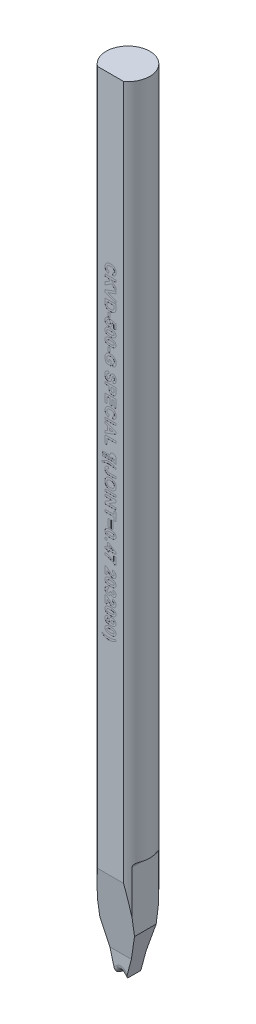
from build123d import *

# Parameters (mm, degrees)
SKETCH_TL_CUTTING_R       = 1.99771
TL_CUTTING_DEPTH          = 72.009
SKETCH_TDF_GRINDING_W     = 4.01542
SKETCH_TDF_GRINDING_H     = 4.01542
TDF_GRINDING_DEPTH        = 73.064400167
SKETCH_ENGRAVING_W        = 0.166666667
SKETCH_ENGRAVING_H        = 0.371794872
SKETCH_ENGRAVING_W_2      = 1
SKETCH_ENGRAVING_H_2      = 0.192307693
SKETCH_ENGRAVING_H_3      = 0.192307692
SKETCH_ENGRAVING_H_4      = 0.692307692
SKETCH_ENGRAVING_W_3      = 0.192307692
ENGRAVING_DEPTH           = 0.005
VW_VR_GRINDING_DEPTH      = 2.00771
VW_VR_GRINDING_DEPTH_BACK = 2.00771
ISA_GRINDING_DEPTH        = 2.00771
ISA_GRINDING_DEPTH_BACK   = 2.00771
PRE_FRX_BRX_DEPTH         = 2.00771
PRE_FRX_BRX_DEPTH_BACK    = 2.00771
SKETCH_PRE_FRX_BRX_W      = 1.33334
SKETCH_PRE_FRX_BRX_H      = 1.80086
FR_EDM_R                  = 0.50038
BR_EDM_R                  = 0.24892
FA_BA_GRINDING_DEPTH      = 2.00771
FA_BA_GRINDING_DEPTH_BACK = 2.00771


with BuildPart() as part:
    # sketch_TL_cutting → TL_cutting (new body)
    with BuildSketch(Plane(origin=(0, 0, 0), x_dir=(1, 0, 0), z_dir=(0, 1, 0))):
        Circle(SKETCH_TL_CUTTING_R)
    extrude(amount=TL_CUTTING_DEPTH)

    # sketch_TDF_grinding → TDF_grinding (cut, through all)
    with BuildSketch(Plane(origin=(0, 0, 0), x_dir=(1, 0, 0), z_dir=(0, 1, 0))):
        with Locations((0, -3.60918)):
            Rectangle(SKETCH_TDF_GRINDING_W, SKETCH_TDF_GRINDING_H)
    extrude(amount=TDF_GRINDING_DEPTH, mode=Mode.SUBTRACT)

    # sketch_engraving → engraving (cut)
    # profile 1 of 38: a face of its own
    with BuildSketch(Plane.XY.offset(1.60147)):
        with BuildLine():
            Line((-0.128205128, 56.265410256), (-0.192307692, 56.073102564))
            add(Edge.make_bspline(
                [(-0.192307692, 56.073102564), (-0.204917923, 56.077009052), (-0.229612721, 56.084659184), (-0.2649877, 56.098737804), (-0.297871332, 56.114732008), (-0.328259475, 56.132559875), (-0.356049464, 56.152295258), (-0.381471598, 56.173789244), (-0.404368127, 56.197253424), (-0.424673345, 56.222670624), (-0.442633936, 56.249763711), (-0.457816548, 56.278856053), (-0.470893242, 56.30951117), (-0.481488041, 56.342040557), (-0.489972889, 56.376228151), (-0.495577171, 56.412234413), (-0.499377062, 56.449890896), (-0.499789062, 56.475603283), (-0.5, 56.488767628)],
                knots=[0, 0, 0, 0, 1.126670901, 2.206376047, 3.246533763, 4.245677351, 5.210506282, 6.152793389, 7.083980095, 8.004497442, 8.926231833, 9.854395169, 10.801995143, 11.768203916, 12.771938831, 13.805609698, 14.87650608, 16, 16, 16, 16], degree=3))
            add(Edge.make_bspline(
                [(-0.5, 56.488767628), (-0.499663994, 56.505016309), (-0.499003061, 56.536977949), (-0.492350465, 56.583719052), (-0.481969511, 56.628260328), (-0.467601869, 56.670669613), (-0.448555271, 56.710648786), (-0.42571373, 56.748573108), (-0.398318662, 56.784009391), (-0.367249987, 56.817150716), (-0.332452821, 56.847279196), (-0.294134751, 56.873272297), (-0.253074131, 56.895810491), (-0.208709772, 56.913736594), (-0.161353037, 56.927821791), (-0.110975156, 56.937668328), (-0.057578507, 56.943834942), (-0.020984357, 56.944537083), (-0.002203526, 56.944897436)],
                knots=[0, 0, 0, 0, 1.025134988, 2.016471176, 2.973446247, 3.909197306, 4.836872559, 5.763618465, 6.698581235, 7.658772073, 8.627106982, 9.597494692, 10.576422683, 11.578339294, 12.6118974, 13.690673505, 14.814808564, 16, 16, 16, 16], degree=3))
            add(Edge.make_bspline(
                [(-0.002203526, 56.944897436), (0.017576475, 56.9445292), (0.056163648, 56.943810839), (0.112313555, 56.937762878), (0.165084042, 56.927716768), (0.214577853, 56.914140058), (0.260470573, 56.895929249), (0.303160692, 56.874073909), (0.342311169, 56.847956152), (0.377833814, 56.818031091), (0.409480853, 56.784897852), (0.437377469, 56.749193428), (0.460593243, 56.710691041), (0.479896446, 56.669867336), (0.494630503, 56.626423397), (0.505304611, 56.580476602), (0.511505561, 56.532006054), (0.512376199, 56.49886808), (0.512820513, 56.481956731)],
                knots=[0, 0, 0, 0, 1.212773307, 2.365899439, 3.458117515, 4.504331001, 5.50806732, 6.480562534, 7.440239902, 8.387651817, 9.323121479, 10.245404239, 11.160468186, 12.07454208, 13.009500751, 13.96802424, 14.963018902, 16, 16, 16, 16], degree=3))
            add(Edge.make_bspline(
                [(0.512820513, 56.481956731), (0.512448361, 56.467187276), (0.511718707, 56.438229796), (0.506761415, 56.395824506), (0.498061698, 56.355636158), (0.486319015, 56.317447521), (0.470821797, 56.281475987), (0.451884357, 56.247657111), (0.429606892, 56.215874651), (0.412205553, 56.196725065), (0.403445513, 56.187084936)],
                knots=[0, 0, 0, 0, 1.098510076, 2.153775193, 3.169777012, 4.153122333, 5.120892526, 6.076995459, 7.031936742, 8, 8, 8, 8], degree=3))
            add(Edge.make_bspline(
                [(0.403445513, 56.187084936), (0.39787141, 56.181497644), (0.386592274, 56.170191818), (0.367549896, 56.155095368), (0.347050772, 56.140782058), (0.324745215, 56.127479068), (0.30046466, 56.115606849), (0.274581981, 56.104594097), (0.246997406, 56.094455069), (0.227800247, 56.088816604), (0.217948718, 56.085923077)],
                knots=[0, 0, 0, 0, 0.885292881, 1.791380647, 2.722937556, 3.69093542, 4.703306561, 5.754477758, 6.847650944, 8, 8, 8, 8], degree=3))
            Line((0.217948718, 56.085923077), (0.179487179, 56.278230769))
            add(Edge.make_bspline(
                [(0.179487179, 56.278230769), (0.1857949, 56.279865288), (0.198219456, 56.283084861), (0.21607256, 56.28959955), (0.233014714, 56.297071208), (0.248625569, 56.3063361), (0.263619506, 56.316162074), (0.277222328, 56.327824773), (0.290109132, 56.340329754), (0.301694454, 56.354218861), (0.312145605, 56.369093589), (0.321339918, 56.384803983), (0.329014435, 56.401388478), (0.335156827, 56.418721754), (0.340319842, 56.436745702), (0.34350638, 56.455632147), (0.345953545, 56.475215752), (0.3460861, 56.488558875), (0.346153846, 56.495378205)],
                knots=[0, 0, 0, 0, 1.051114734, 2.070420253, 3.064047898, 4.034553068, 4.997066449, 5.953344811, 6.921213386, 7.892675544, 8.867420182, 9.852654213, 10.826683617, 11.811917648, 12.818610352, 13.848120519, 14.900229319, 16, 16, 16, 16], degree=3))
            add(Edge.make_bspline(
                [(0.346153846, 56.495378205), (0.345958725, 56.504742256), (0.345576529, 56.52308423), (0.341532101, 56.54981448), (0.335695112, 56.575255692), (0.326982094, 56.59931706), (0.315677399, 56.621931698), (0.302244603, 56.643428905), (0.286035184, 56.663260806), (0.26758257, 56.681899764), (0.246135655, 56.698607721), (0.221779967, 56.713310652), (0.194212535, 56.725504121), (0.163711493, 56.735404409), (0.130202077, 56.743196736), (0.093641969, 56.748761162), (0.054005962, 56.751838434), (0.026581025, 56.752333903), (0.012419872, 56.752589744)],
                knots=[0, 0, 0, 0, 0.93816214, 1.837638998, 2.704791736, 3.551915875, 4.396257554, 5.235807848, 6.087970119, 6.959042444, 7.860386085, 8.80649345, 9.804409709, 10.875695391, 12.017327537, 13.250155505, 14.580089023, 16, 16, 16, 16], degree=3))
            add(Edge.make_bspline(
                [(0.012419872, 56.752589744), (-0.002609028, 56.752336423), (-0.031567402, 56.751848312), (-0.073337178, 56.748771685), (-0.111754322, 56.743171705), (-0.14688701, 56.735482849), (-0.178713725, 56.725532973), (-0.207179389, 56.713359106), (-0.23231734, 56.698886701), (-0.254110839, 56.682138275), (-0.272831387, 56.663537256), (-0.288926796, 56.643587439), (-0.302688307, 56.622406524), (-0.314010391, 56.599867053), (-0.322575422, 56.575883298), (-0.328786932, 56.550652371), (-0.332735688, 56.524081695), (-0.333131326, 56.505875799), (-0.333333333, 56.496580128)],
                knots=[0, 0, 0, 0, 1.475208372, 2.842499301, 4.107722225, 5.282836115, 6.369007568, 7.375918121, 8.315702116, 9.208439171, 10.065831443, 10.90006451, 11.71996243, 12.54067204, 13.369972975, 14.214060185, 15.088124569, 16, 16, 16, 16], degree=3))
            add(Edge.make_bspline(
                [(-0.333333333, 56.496580128), (-0.333161634, 56.489697953), (-0.332824013, 56.476165176), (-0.330681155, 56.456162689), (-0.326591822, 56.43696438), (-0.321184418, 56.418476281), (-0.314399721, 56.400626559), (-0.305696319, 56.38368748), (-0.295693052, 56.367325777), (-0.283969989, 56.35188094), (-0.270808612, 56.337146156), (-0.255597341, 56.323707159), (-0.238701667, 56.311241373), (-0.220008678, 56.299906947), (-0.199678377, 56.28932516), (-0.177394008, 56.280322121), (-0.153515697, 56.271934984), (-0.136789345, 56.267623153), (-0.128205128, 56.265410256)],
                knots=[0, 0, 0, 0, 0.980177776, 1.927374078, 2.859849964, 3.771585772, 4.668674471, 5.574490016, 6.479656464, 7.396337719, 8.332153134, 9.288470092, 10.28125149, 11.318486971, 12.398724812, 13.541284404, 14.738150009, 16, 16, 16, 16], degree=3))
        make_face()
    # profile 2 of 38: a face of its own
    with BuildSketch(Plane.XY.offset(1.60147)):
        Polygon((-0.5, 55.906435897), (0.5, 55.906435897), (0.5, 55.714128205), (0.052283654, 55.714128205), (0.5, 55.292453526), (0.5, 55.028230769), (0.11338141, 55.408038462), (-0.5, 55.015410256), (-0.5, 55.271620192), (-0.035456731, 55.553871795), (-0.198517628, 55.714128205), (-0.5, 55.714128205), align=None)
    # profile 3 of 38: a face of its own
    with BuildSketch(Plane.XY.offset(1.60147)):
        Polygon((-0.5, 54.639208333), (0.5, 55.009), (0.5, 54.805875), (-0.243589744, 54.541051282), (0.5, 54.277229167), (0.5, 54.073102564), (-0.5, 54.441491987), align=None)
    # profile 4 of 38: a face of its own
    with BuildSketch(Plane.XY.offset(1.60147)):
        with BuildLine():
            Line((0.5, 53.983358974), (0.5, 53.616572115))
            add(Edge.make_bspline(
                [(0.5, 53.616572115), (0.500005193, 53.606554571), (0.500015306, 53.587048084), (0.498840892, 53.558739066), (0.497659587, 53.532266494), (0.495294873, 53.507706352), (0.492816233, 53.484973432), (0.489678088, 53.464026942), (0.485656212, 53.444999202), (0.482484481, 53.433000319), (0.480969551, 53.427269231)],
                knots=[0, 0, 0, 0, 1.259756885, 2.453039283, 3.563158368, 4.591894114, 5.55549294, 6.43918076, 7.254497783, 8, 8, 8, 8], degree=3))
            add(Edge.make_bspline(
                [(0.480969551, 53.427269231), (0.478637325, 53.420100254), (0.474014881, 53.405891431), (0.465827813, 53.385038378), (0.455960096, 53.365204479), (0.445111978, 53.345929819), (0.432903728, 53.327657553), (0.419595761, 53.309942873), (0.404753223, 53.293309803), (0.383633179, 53.27177514), (0.35420815, 53.247350255), (0.315375005, 53.22151972), (0.272594656, 53.199782014), (0.234409605, 53.184590641), (0.20183843, 53.174546542), (0.175754603, 53.167978141), (0.148301213, 53.162306468), (0.119383738, 53.158056292), (0.08913491, 53.154394906), (0.057465542, 53.151767238), (0.024383276, 53.15046625), (0.001870575, 53.150174494), (-0.009615385, 53.150025641)],
                knots=[0, 0, 0, 0, 0.745431882, 1.477436776, 2.212739876, 2.934276521, 3.663147754, 4.384200836, 5.123377481, 5.865761747, 7.365547505, 8.894711587, 10.468722596, 12.101948761, 12.951987285, 13.837595333, 14.760899389, 15.722756883, 16.726861385, 17.773652936, 18.864119771, 20, 20, 20, 20], degree=3))
            add(Edge.make_bspline(
                [(-0.009615385, 53.150025641), (-0.0294616, 53.150417046), (-0.067834928, 53.15117384), (-0.123301552, 53.156771211), (-0.17465514, 53.166066648), (-0.206804138, 53.175777075), (-0.222355769, 53.180474359)],
                knots=[0, 0, 0, 0, 1.103491527, 2.133638164, 3.0971734, 4, 4, 4, 4], degree=3))
            add(Edge.make_bspline(
                [(-0.222355769, 53.180474359), (-0.231274521, 53.183648003), (-0.248819098, 53.189891057), (-0.274127236, 53.200815932), (-0.298211673, 53.212620337), (-0.321053432, 53.225402184), (-0.342549771, 53.239226052), (-0.362636394, 53.254143645), (-0.381577746, 53.269923731), (-0.393236239, 53.28135549), (-0.399038462, 53.287044872)],
                knots=[0, 0, 0, 0, 1.090884612, 2.145940218, 3.175104604, 4.181306866, 5.161203701, 6.118658341, 7.063689906, 8, 8, 8, 8], degree=3))
            add(Edge.make_bspline(
                [(-0.399038462, 53.287044872), (-0.407300305, 53.296331145), (-0.424264154, 53.315398431), (-0.445652736, 53.34874995), (-0.464086504, 53.386625276), (-0.473760833, 53.413939168), (-0.478766026, 53.428070513)],
                knots=[0, 0, 0, 0, 0.912008655, 1.872605891, 2.89935344, 4, 4, 4, 4], degree=3))
            add(Edge.make_bspline(
                [(-0.478766026, 53.428070513), (-0.4805228, 53.433790486), (-0.484168894, 53.445661996), (-0.488062998, 53.464485444), (-0.492165475, 53.484579947), (-0.49463687, 53.506177223), (-0.497243066, 53.529053081), (-0.498706299, 53.553389822), (-0.49974511, 53.579103081), (-0.499913777, 53.596739175), (-0.5, 53.605754808)],
                knots=[0, 0, 0, 0, 0.799129865, 1.658552685, 2.566799617, 3.538529252, 4.561352959, 5.643373779, 6.795284424, 8, 8, 8, 8], degree=3))
            Line((-0.5, 53.605754808), (-0.5, 53.983358974))
            Line((-0.5, 53.983358974), (0.5, 53.983358974))
        make_face()
        with BuildLine():
            Line((0.333333333, 53.791051282), (-0.333333333, 53.791051282))
            Line((-0.333333333, 53.791051282), (-0.333333333, 53.632798077))
            add(Edge.make_bspline(
                [(-0.333333333, 53.632798077), (-0.333276671, 53.62565336), (-0.333167574, 53.611897049), (-0.332847006, 53.591991316), (-0.331979167, 53.573698115), (-0.331080228, 53.556921614), (-0.329595022, 53.54170549), (-0.328134266, 53.527983535), (-0.326090699, 53.515832132), (-0.324477534, 53.508327127), (-0.323717949, 53.504793269)],
                knots=[0, 0, 0, 0, 1.333384787, 2.567275092, 3.714769766, 4.750907381, 5.701951617, 6.567520054, 7.325492842, 8, 8, 8, 8], degree=3))
            add(Edge.make_bspline(
                [(-0.323717949, 53.504793269), (-0.321509316, 53.496516575), (-0.317207482, 53.480395757), (-0.307617456, 53.457760499), (-0.296048139, 53.437278507), (-0.282136533, 53.41860677), (-0.26455548, 53.40177967), (-0.242070693, 53.387415683), (-0.215254411, 53.374122192), (-0.189584523, 53.365018806), (-0.16665678, 53.358484413), (-0.147412959, 53.354061165), (-0.126593091, 53.350565591), (-0.104279343, 53.347558942), (-0.080500412, 53.345129499), (-0.055170426, 53.343617784), (-0.028320392, 53.342586029), (-0.009883527, 53.342419161), (-0.000400641, 53.342333333)],
                knots=[0, 0, 0, 0, 1.038686998, 2.023088296, 2.974059649, 3.888265163, 4.839857954, 5.909819677, 7.113156087, 8.466843969, 9.20827164, 10.006482943, 10.861893492, 11.769681931, 12.739021491, 13.762258324, 14.849031541, 16, 16, 16, 16], degree=3))
            add(Edge.make_bspline(
                [(-0.000400641, 53.342333333), (0.009082275, 53.3424185), (0.027452469, 53.342583485), (0.054102292, 53.343613664), (0.079033415, 53.345116863), (0.102276578, 53.347563691), (0.123864169, 53.350523456), (0.143813574, 53.354060891), (0.161996804, 53.358454423), (0.183589283, 53.365007511), (0.207947697, 53.374844996), (0.23429421, 53.388671199), (0.2571147, 53.404936402), (0.276689574, 53.423291558), (0.29287817, 53.444378569), (0.306422028, 53.467749371), (0.316938162, 53.493880279), (0.321416742, 53.512469318), (0.323717949, 53.522020833)],
                knots=[0, 0, 0, 0, 1.118059345, 2.165891593, 3.144157881, 4.062285166, 4.920717571, 5.712910489, 6.449981617, 7.12489426, 8.371943983, 9.541298068, 10.624898781, 11.666293176, 12.69306237, 13.747704633, 14.842713931, 16, 16, 16, 16], degree=3))
            add(Edge.make_bspline(
                [(0.323717949, 53.522020833), (0.324486218, 53.526155143), (0.326177652, 53.535257311), (0.328151987, 53.550361571), (0.329628909, 53.568148179), (0.331099472, 53.588577116), (0.331977905, 53.611627064), (0.332859431, 53.637332571), (0.333166326, 53.665716851), (0.333276065, 53.685549207), (0.333333333, 53.695899038)],
                knots=[0, 0, 0, 0, 0.578739524, 1.274162912, 2.095457587, 3.035141998, 4.093102578, 5.270121571, 6.575369351, 8, 8, 8, 8], degree=3))
            Line((0.333333333, 53.695899038), (0.333333333, 53.791051282))
        make_face(mode=Mode.SUBTRACT)
    # profile 5 of 38: a face of its own
    with BuildSketch(Plane.XY.offset(1.60147)):
        with Locations((-0.147435898, 52.823102564)):
            Rectangle(SKETCH_ENGRAVING_W, SKETCH_ENGRAVING_H)
    # profile 6 of 38: a face of its own
    with BuildSketch(Plane.XY.offset(1.60147)):
        with BuildLine():
            Line((-0.213942308, 52.573102564), (-0.192307692, 52.406435897))
            add(Edge.make_bspline(
                [(-0.192307692, 52.406435897), (-0.203607347, 52.404586826), (-0.225366694, 52.401026133), (-0.255826929, 52.390063828), (-0.282470914, 52.374435917), (-0.305088238, 52.354761759), (-0.323334969, 52.332318846), (-0.336523954, 52.307649962), (-0.344692684, 52.281280099), (-0.34566455, 52.262996649), (-0.346153846, 52.253791667)],
                knots=[0, 0, 0, 0, 1.155217688, 2.224562036, 3.249849536, 4.259092678, 5.238040954, 6.15568152, 7.071459712, 8, 8, 8, 8], degree=3))
            add(Edge.make_bspline(
                [(-0.346153846, 52.253791667), (-0.346059894, 52.248443112), (-0.34587598, 52.237973234), (-0.34378776, 52.222544535), (-0.340396301, 52.20780521), (-0.335789422, 52.193618977), (-0.329745146, 52.180121981), (-0.322266898, 52.16729854), (-0.313608966, 52.15499075), (-0.303697677, 52.143355274), (-0.29215854, 52.13291258), (-0.27939506, 52.123638023), (-0.265101057, 52.116050338), (-0.249674797, 52.109508976), (-0.232663378, 52.104881315), (-0.214481969, 52.101169692), (-0.194883734, 52.099284068), (-0.18142672, 52.098927617), (-0.174479167, 52.09874359)],
                knots=[0, 0, 0, 0, 0.98109136, 1.920501424, 2.850996269, 3.75396817, 4.653607445, 5.559568228, 6.474190795, 7.412641135, 8.358186253, 9.324081521, 10.300185094, 11.322066343, 12.392681767, 13.529496655, 14.72453472, 16, 16, 16, 16], degree=3))
            add(Edge.make_bspline(
                [(-0.174479167, 52.09874359), (-0.167930185, 52.098847549), (-0.155273198, 52.099048469), (-0.136935362, 52.10091253), (-0.119798482, 52.103773852), (-0.103987864, 52.108325768), (-0.089209555, 52.113524403), (-0.075987454, 52.120533513), (-0.063746794, 52.128224163), (-0.053149329, 52.13759838), (-0.04378212, 52.147810732), (-0.035449479, 52.158693065), (-0.028416647, 52.170390594), (-0.022600846, 52.18279263), (-0.018105451, 52.195952809), (-0.015265585, 52.209899831), (-0.013079926, 52.224477064), (-0.012907894, 52.234485328), (-0.012820513, 52.23956891)],
                knots=[0, 0, 0, 0, 1.292262537, 2.497510385, 3.635136149, 4.715991128, 5.741845981, 6.720379908, 7.663568786, 8.58853187, 9.502632107, 10.396263742, 11.289117461, 12.191261909, 13.095714127, 14.026387781, 14.997526353, 16, 16, 16, 16], degree=3))
            add(Edge.make_bspline(
                [(-0.012820513, 52.23956891), (-0.013050924, 52.245995741), (-0.013510598, 52.25881737), (-0.017247301, 52.277744398), (-0.02333068, 52.29616685), (-0.031799166, 52.314065577), (-0.042720432, 52.331393226), (-0.056130694, 52.348074776), (-0.071799231, 52.364396575), (-0.083638008, 52.374422371), (-0.08974359, 52.379592949)],
                knots=[0, 0, 0, 0, 0.931687088, 1.85873035, 2.786835662, 3.740075265, 4.723687035, 5.750832598, 6.840042753, 8, 8, 8, 8], degree=3))
            Line((-0.08974359, 52.379592949), (-0.066105769, 52.547461538))
            Line((-0.066105769, 52.547461538), (0.487179487, 52.432076923))
            Line((0.487179487, 52.432076923), (0.487179487, 51.944897436))
            Line((0.487179487, 51.944897436), (0.294871795, 51.944897436))
            Line((0.294871795, 51.944897436), (0.294871795, 52.277830128))
            Line((0.294871795, 52.277830128), (0.116386218, 52.317092949))
            add(Edge.make_bspline(
                [(0.116386218, 52.317092949), (0.122158957, 52.307087656), (0.133400829, 52.287603282), (0.144973305, 52.25649635), (0.152400706, 52.225229621), (0.153366831, 52.204152487), (0.153846154, 52.193695513)],
                knots=[0, 0, 0, 0, 1.060051984, 2.064352337, 3.039669322, 4, 4, 4, 4], degree=3))
            add(Edge.make_bspline(
                [(0.153846154, 52.193695513), (0.153581613, 52.183865068), (0.153059042, 52.164446132), (0.148771515, 52.135966641), (0.141705229, 52.108649395), (0.131871753, 52.08240215), (0.118982632, 52.057412644), (0.103404168, 52.033465451), (0.084866032, 52.010906296), (0.063903438, 51.989492789), (0.04071085, 51.969965174), (0.015420507, 51.953101525), (-0.011337699, 51.938536215), (-0.039859413, 51.926678326), (-0.070184315, 51.917748996), (-0.102051282, 51.91106179), (-0.135661543, 51.907315665), (-0.158578281, 51.906733149), (-0.170272436, 51.906435897)],
                knots=[0, 0, 0, 0, 0.974409932, 1.924837087, 2.848242317, 3.768103797, 4.697919751, 5.630842317, 6.595644344, 7.588240789, 8.59876155, 9.595918743, 10.597287627, 11.615415169, 12.652315553, 13.727511434, 14.840374562, 16, 16, 16, 16], degree=3))
            add(Edge.make_bspline(
                [(-0.170272436, 51.906435897), (-0.180095164, 51.90670219), (-0.199591316, 51.907230727), (-0.228431015, 51.910374662), (-0.256480502, 51.916084756), (-0.283660862, 51.923892183), (-0.310181667, 51.93373598), (-0.335760069, 51.945979792), (-0.360613268, 51.960472719), (-0.376286294, 51.971679985), (-0.384214744, 51.977349359)],
                knots=[0, 0, 0, 0, 1.0275977, 2.039576086, 3.029943557, 4.018141221, 4.995043124, 5.985410594, 6.980887897, 8, 8, 8, 8], degree=3))
            add(Edge.make_bspline(
                [(-0.384214744, 51.977349359), (-0.39442561, 51.985610871), (-0.414521783, 52.001870487), (-0.440928765, 52.029712796), (-0.463196136, 52.060010934), (-0.481238657, 52.092734524), (-0.495700415, 52.127611763), (-0.505577236, 52.165007561), (-0.511741284, 52.20464131), (-0.51245553, 52.231866597), (-0.512820513, 52.245778846)],
                knots=[0, 0, 0, 0, 1.018155984, 2.003849412, 2.967446846, 3.927472908, 4.896208823, 5.888955604, 6.921246412, 8, 8, 8, 8], degree=3))
            add(Edge.make_bspline(
                [(-0.512820513, 52.245778846), (-0.51261689, 52.257007919), (-0.512219305, 52.278933296), (-0.508313832, 52.311046963), (-0.50189785, 52.341525845), (-0.493201931, 52.370514952), (-0.481586571, 52.397739005), (-0.467806969, 52.423532218), (-0.451267563, 52.447697806), (-0.432181131, 52.470093624), (-0.411081442, 52.490657914), (-0.387995531, 52.509000686), (-0.363308362, 52.52532086), (-0.336770788, 52.539307199), (-0.308568836, 52.551226858), (-0.278557994, 52.560717794), (-0.246938394, 52.568532152), (-0.225062746, 52.57156223), (-0.213942308, 52.573102564)],
                knots=[0, 0, 0, 0, 1.098896741, 2.145655864, 3.16104256, 4.145315902, 5.10323158, 6.053780891, 7.003858069, 7.963890296, 8.930045353, 9.883557002, 10.846278307, 11.82296847, 12.816080213, 13.83936887, 14.901647787, 16, 16, 16, 16], degree=3))
        make_face()
    # profile 7 of 38: a face of its own
    with BuildSketch(Plane.XY.offset(1.60147)):
        with BuildLine():
            add(Edge.make_bspline(
                [(0.5, 51.476948718), (0.49971384, 51.465044998), (0.499156721, 51.441869821), (0.494192381, 51.408107508), (0.486315205, 51.376354925), (0.474936732, 51.346605943), (0.460535804, 51.318709267), (0.442472771, 51.293057415), (0.421624591, 51.26905643), (0.405435577, 51.255200797), (0.397235577, 51.248182692)],
                knots=[0, 0, 0, 0, 1.098626248, 2.138899374, 3.143835643, 4.113754749, 5.073488057, 6.034745239, 7.004566348, 8, 8, 8, 8], degree=3))
            add(Edge.make_bspline(
                [(0.397235577, 51.248182692), (0.392013767, 51.244167993), (0.381356969, 51.235974695), (0.364136726, 51.22494029), (0.345869985, 51.214331685), (0.326116385, 51.205073442), (0.305221356, 51.196200078), (0.283126793, 51.188009313), (0.259707844, 51.18077695), (0.235071142, 51.174472124), (0.209179241, 51.168578627), (0.181968999, 51.163641398), (0.15350924, 51.159415972), (0.123831018, 51.156120738), (0.092992495, 51.153166339), (0.060842825, 51.151549757), (0.027454838, 51.150225267), (0.004742429, 51.150092949), (-0.006810897, 51.150025641)],
                knots=[0, 0, 0, 0, 0.746775751, 1.524038446, 2.317840886, 3.141016509, 3.996283186, 4.892488336, 5.812382473, 6.774967264, 7.776368117, 8.823659909, 9.910833035, 11.039122168, 12.210293276, 13.424012874, 14.68964937, 16, 16, 16, 16], degree=3))
            add(Edge.make_bspline(
                [(-0.006810897, 51.150025641), (-0.01836425, 51.150091934), (-0.041009977, 51.150221876), (-0.074330982, 51.151554693), (-0.106413621, 51.153167781), (-0.13725379, 51.156113853), (-0.166926114, 51.159440728), (-0.195353975, 51.163546272), (-0.22243919, 51.168864764), (-0.248289812, 51.174671418), (-0.27303117, 51.180936077), (-0.296407841, 51.1884899), (-0.318777777, 51.196350303), (-0.339699687, 51.205429898), (-0.359477735, 51.215020372), (-0.377930928, 51.225471112), (-0.395257891, 51.236628726), (-0.40597091, 51.244901289), (-0.411258013, 51.248983974)],
                knots=[0, 0, 0, 0, 1.308411734, 2.564617834, 3.776541518, 4.94597967, 6.0725993, 7.15816376, 8.197872509, 9.197791611, 10.158952087, 11.086962723, 11.979249638, 12.843171697, 13.668427753, 14.467630577, 15.243743175, 16, 16, 16, 16], degree=3))
            add(Edge.make_bspline(
                [(-0.411258013, 51.248983974), (-0.419387722, 51.255937875), (-0.435436162, 51.269665209), (-0.456111536, 51.293400465), (-0.473801555, 51.3190109), (-0.487914093, 51.346857064), (-0.499368982, 51.376461236), (-0.506993451, 51.408265546), (-0.511967929, 51.441935616), (-0.512532265, 51.465111213), (-0.512820513, 51.476948718)],
                knots=[0, 0, 0, 0, 0.991667276, 1.957599061, 2.911530233, 3.873218945, 4.847995157, 5.850445929, 6.902062539, 8, 8, 8, 8], degree=3))
            add(Edge.make_bspline(
                [(-0.512820513, 51.476948718), (-0.512476011, 51.488921133), (-0.511800941, 51.512381702), (-0.506449472, 51.546635149), (-0.497876451, 51.579194622), (-0.485636462, 51.609943234), (-0.469774335, 51.638836989), (-0.45076002, 51.666101616), (-0.427732542, 51.691143948), (-0.40629523, 51.710749361), (-0.386925042, 51.725092741), (-0.37086259, 51.735209036), (-0.353675124, 51.744985358), (-0.33482528, 51.753423499), (-0.314870578, 51.761748475), (-0.293380967, 51.769121787), (-0.270541238, 51.775626959), (-0.246455682, 51.781734901), (-0.220958398, 51.786828025), (-0.194124629, 51.791512952), (-0.165840258, 51.795204927), (-0.136262825, 51.798478243), (-0.105322509, 51.800782844), (-0.073069943, 51.802654475), (-0.039401887, 51.803592969), (-0.01649349, 51.803777608), (-0.004807692, 51.803871795)],
                knots=[0, 0, 0, 0, 1.257818097, 2.464759732, 3.634271214, 4.790227596, 5.933394726, 7.09190477, 8.274482889, 9.50191983, 10.139172818, 10.805000628, 11.49619854, 12.215266328, 12.973768034, 13.768328009, 14.601232062, 15.469317089, 16.379095881, 17.333267023, 18.331755967, 19.376479622, 20.460535752, 21.592206075, 22.771760786, 24, 24, 24, 24], degree=3))
            add(Edge.make_bspline(
                [(-0.004807692, 51.803871795), (0.006678925, 51.803806), (0.02919122, 51.803677052), (0.062378132, 51.802334948), (0.094328674, 51.800741634), (0.12509981, 51.79776902), (0.154640959, 51.794469515), (0.183004063, 51.790356894), (0.209982531, 51.784938814), (0.235876189, 51.779589743), (0.260431507, 51.772849782), (0.2837906, 51.765424475), (0.306110518, 51.757590136), (0.326924245, 51.748417854), (0.346659803, 51.738882898), (0.365109758, 51.728424838), (0.382437536, 51.717269066), (0.39315045, 51.708996265), (0.3984375, 51.704913462)],
                knots=[0, 0, 0, 0, 1.304443357, 2.556541329, 3.771813033, 4.936929721, 6.066661712, 7.147723817, 8.190304831, 9.191350322, 10.149780912, 11.080355239, 11.975107155, 12.834450748, 13.66198663, 14.463397305, 15.241653965, 16, 16, 16, 16], degree=3))
            add(Edge.make_bspline(
                [(0.3984375, 51.704913462), (0.406566428, 51.697959179), (0.422613323, 51.684231089), (0.443299998, 51.660501361), (0.460913987, 51.634919209), (0.475197493, 51.607154301), (0.486497465, 51.577482107), (0.494183265, 51.545636121), (0.499144648, 51.511960686), (0.499710816, 51.488785839), (0.5, 51.476948718)],
                knots=[0, 0, 0, 0, 0.991631672, 1.957528776, 2.911425699, 3.867574088, 4.848108326, 5.850523106, 6.902101959, 8, 8, 8, 8], degree=3))
        make_face()
        with BuildLine():
            add(Edge.make_bspline(
                [(0.333333333, 51.476948718), (0.333068079, 51.483116684), (0.332548986, 51.495187158), (0.328316127, 51.512742094), (0.321759633, 51.529323165), (0.312130705, 51.544881206), (0.299093083, 51.55928978), (0.281476094, 51.571497658), (0.259881539, 51.582051162), (0.243736, 51.587330771), (0.235176282, 51.590129808)],
                knots=[0, 0, 0, 0, 0.909107913, 1.77908945, 2.650019014, 3.530482969, 4.465025013, 5.495890128, 6.672421267, 8, 8, 8, 8], degree=3))
            add(Edge.make_bspline(
                [(0.235176282, 51.590129808), (0.228718042, 51.591877997), (0.214837576, 51.595635317), (0.192206647, 51.59989972), (0.166522939, 51.603416485), (0.137792419, 51.606386038), (0.105999886, 51.608802628), (0.071125109, 51.610290848), (0.033192525, 51.611319478), (0.006878451, 51.611480391), (-0.006810897, 51.611564103)],
                knots=[0, 0, 0, 0, 0.658986521, 1.416336438, 2.266694271, 3.212608458, 4.261595115, 5.407496572, 6.651304179, 8, 8, 8, 8], degree=3))
            add(Edge.make_bspline(
                [(-0.006810897, 51.611564103), (-0.020433943, 51.611573117), (-0.046549094, 51.611590397), (-0.084006477, 51.610416163), (-0.118154033, 51.60924872), (-0.148991056, 51.606879061), (-0.176626244, 51.604540892), (-0.200847568, 51.601003343), (-0.221857789, 51.597450608), (-0.244486895, 51.591417153), (-0.268257705, 51.583101394), (-0.292448985, 51.571872977), (-0.311537375, 51.559207058), (-0.325415776, 51.544675587), (-0.334597404, 51.528930329), (-0.341538269, 51.512626395), (-0.345246665, 51.495074555), (-0.345848983, 51.483040013), (-0.346153846, 51.476948718)],
                knots=[0, 0, 0, 0, 1.613038927, 3.092168624, 4.43749063, 5.658264602, 6.75425577, 7.720394221, 8.556328411, 9.275513998, 10.490872946, 11.534172084, 12.42681833, 13.187531851, 13.88996177, 14.574222125, 15.278341114, 16, 16, 16, 16], degree=3))
            add(Edge.make_bspline(
                [(-0.346153846, 51.476948718), (-0.345874419, 51.47085088), (-0.345321688, 51.458788799), (-0.341225408, 51.441256833), (-0.334465655, 51.424699336), (-0.325029126, 51.409036493), (-0.311901617, 51.39461441), (-0.294300445, 51.382397614), (-0.272700888, 51.37184693), (-0.25655611, 51.366566893), (-0.247996795, 51.363767628)],
                knots=[0, 0, 0, 0, 0.899391665, 1.779078861, 2.640979247, 3.529945348, 4.464599804, 5.495588918, 6.672261578, 8, 8, 8, 8], degree=3))
            add(Edge.make_bspline(
                [(-0.247996795, 51.363767628), (-0.241538043, 51.362021968), (-0.227719754, 51.358287186), (-0.205229709, 51.353992396), (-0.179679092, 51.35046611), (-0.151079269, 51.347524791), (-0.11935541, 51.345084431), (-0.084546407, 51.343608845), (-0.046680798, 51.342579247), (-0.020433482, 51.342417356), (-0.006810897, 51.342333333)],
                knots=[0, 0, 0, 0, 0.66114423, 1.414496391, 2.261103113, 3.210114492, 4.255954433, 5.405607896, 6.653488082, 8, 8, 8, 8], degree=3))
            add(Edge.make_bspline(
                [(-0.006810897, 51.342333333), (0.006810741, 51.342447109), (0.032921137, 51.342665199), (0.070464093, 51.343292091), (0.104645163, 51.345047006), (0.13553417, 51.346803226), (0.163028833, 51.349768631), (0.187277888, 51.352711537), (0.208178651, 51.356783667), (0.23096624, 51.362375697), (0.254848985, 51.37071368), (0.278913284, 51.38228584), (0.298191428, 51.39472291), (0.312146257, 51.409229879), (0.321683592, 51.424948044), (0.328364426, 51.441400374), (0.332523972, 51.458849531), (0.333060584, 51.47084941), (0.333333333, 51.476948718)],
                knots=[0, 0, 0, 0, 1.611458614, 3.088895909, 4.441089836, 5.660086535, 6.747875232, 7.711965119, 8.548505902, 9.26500436, 10.486583113, 11.532259092, 12.419544583, 13.184925779, 13.890764661, 14.581638641, 15.279074115, 16, 16, 16, 16], degree=3))
        make_face(mode=Mode.SUBTRACT)
    # profile 8 of 38: a face of its own
    with BuildSketch(Plane.XY.offset(1.60147)):
        with BuildLine():
            add(Edge.make_bspline(
                [(0.5, 50.707717949), (0.49971384, 50.695814229), (0.499156721, 50.672639051), (0.494192381, 50.638876739), (0.486315205, 50.607124156), (0.474936732, 50.577375173), (0.460535804, 50.549478497), (0.442472771, 50.523826646), (0.421624591, 50.499825661), (0.405435577, 50.485970028), (0.397235577, 50.478951923)],
                knots=[0, 0, 0, 0, 1.098626248, 2.138899374, 3.143835643, 4.113754749, 5.073488057, 6.034745239, 7.004566348, 8, 8, 8, 8], degree=3))
            add(Edge.make_bspline(
                [(0.397235577, 50.478951923), (0.392013767, 50.474937224), (0.381356969, 50.466743926), (0.364136726, 50.45570952), (0.345869985, 50.445100915), (0.326116385, 50.435842673), (0.305221356, 50.426969309), (0.283126793, 50.418778544), (0.259707844, 50.41154618), (0.235071142, 50.405241354), (0.209179241, 50.399347858), (0.181968999, 50.394410628), (0.15350924, 50.390185203), (0.123831018, 50.386889969), (0.092992495, 50.38393557), (0.060842825, 50.382318988), (0.027454838, 50.380994498), (0.004742429, 50.380862179), (-0.006810897, 50.380794872)],
                knots=[0, 0, 0, 0, 0.746775751, 1.524038446, 2.317840886, 3.141016509, 3.996283186, 4.892488336, 5.812382473, 6.774967264, 7.776368117, 8.823659909, 9.910833035, 11.039122168, 12.210293276, 13.424012874, 14.68964937, 16, 16, 16, 16], degree=3))
            add(Edge.make_bspline(
                [(-0.006810897, 50.380794872), (-0.01836425, 50.380861165), (-0.041009977, 50.380991107), (-0.074330982, 50.382323924), (-0.106413621, 50.383937012), (-0.13725379, 50.386883084), (-0.166926114, 50.390209959), (-0.195353975, 50.394315503), (-0.22243919, 50.399633995), (-0.248289812, 50.405440649), (-0.27303117, 50.411705308), (-0.296407841, 50.419259131), (-0.318777777, 50.427119533), (-0.339699687, 50.436199129), (-0.359477735, 50.445789602), (-0.377930928, 50.456240342), (-0.395257891, 50.467397957), (-0.40597091, 50.47567052), (-0.411258013, 50.479753205)],
                knots=[0, 0, 0, 0, 1.308411734, 2.564617834, 3.776541518, 4.94597967, 6.0725993, 7.15816376, 8.197872509, 9.197791611, 10.158952087, 11.086962723, 11.979249638, 12.843171697, 13.668427753, 14.467630577, 15.243743175, 16, 16, 16, 16], degree=3))
            add(Edge.make_bspline(
                [(-0.411258013, 50.479753205), (-0.419387722, 50.486707105), (-0.435436162, 50.50043444), (-0.456111536, 50.524169695), (-0.473801555, 50.549780131), (-0.487914093, 50.577626295), (-0.499368982, 50.607230467), (-0.506993451, 50.639034777), (-0.511967929, 50.672704847), (-0.512532265, 50.695880444), (-0.512820513, 50.707717949)],
                knots=[0, 0, 0, 0, 0.991667276, 1.957599061, 2.911530233, 3.873218945, 4.847995157, 5.850445929, 6.902062539, 8, 8, 8, 8], degree=3))
            add(Edge.make_bspline(
                [(-0.512820513, 50.707717949), (-0.512476011, 50.719690364), (-0.511800941, 50.743150933), (-0.506449472, 50.777404379), (-0.497876451, 50.809963853), (-0.485636462, 50.840712465), (-0.469774335, 50.86960622), (-0.45076002, 50.896870847), (-0.427732542, 50.921913179), (-0.40629523, 50.941518592), (-0.386925042, 50.955861971), (-0.37086259, 50.965978267), (-0.353675124, 50.975754589), (-0.33482528, 50.98419273), (-0.314870578, 50.992517706), (-0.293380967, 50.999891018), (-0.270541238, 51.00639619), (-0.246455682, 51.012504132), (-0.220958398, 51.017597256), (-0.194124629, 51.022282183), (-0.165840258, 51.025974157), (-0.136262825, 51.029247473), (-0.105322509, 51.031552075), (-0.073069943, 51.033423706), (-0.039401887, 51.0343622), (-0.01649349, 51.034546839), (-0.004807692, 51.034641026)],
                knots=[0, 0, 0, 0, 1.257818097, 2.464759732, 3.634271214, 4.790227596, 5.933394726, 7.09190477, 8.274482889, 9.50191983, 10.139172818, 10.805000628, 11.49619854, 12.215266328, 12.973768034, 13.768328009, 14.601232062, 15.469317089, 16.379095881, 17.333267023, 18.331755967, 19.376479622, 20.460535752, 21.592206075, 22.771760786, 24, 24, 24, 24], degree=3))
            add(Edge.make_bspline(
                [(-0.004807692, 51.034641026), (0.006678925, 51.034575231), (0.02919122, 51.034446282), (0.062378132, 51.033104179), (0.094328674, 51.031510865), (0.12509981, 51.028538251), (0.154640959, 51.025238746), (0.183004063, 51.021126125), (0.209982531, 51.015708045), (0.235876189, 51.010358974), (0.260431507, 51.003619013), (0.2837906, 50.996193706), (0.306110518, 50.988359367), (0.326924245, 50.979187084), (0.346659803, 50.969652128), (0.365109758, 50.959194069), (0.382437536, 50.948038297), (0.39315045, 50.939765495), (0.3984375, 50.935682692)],
                knots=[0, 0, 0, 0, 1.304443357, 2.556541329, 3.771813033, 4.936929721, 6.066661712, 7.147723817, 8.190304831, 9.191350322, 10.149780912, 11.080355239, 11.975107155, 12.834450748, 13.66198663, 14.463397305, 15.241653965, 16, 16, 16, 16], degree=3))
            add(Edge.make_bspline(
                [(0.3984375, 50.935682692), (0.406566428, 50.92872841), (0.422613323, 50.91500032), (0.443299998, 50.891270592), (0.460913987, 50.865688439), (0.475197493, 50.837923532), (0.486497465, 50.808251338), (0.494183265, 50.776405352), (0.499144648, 50.742729916), (0.499710816, 50.71955507), (0.5, 50.707717949)],
                knots=[0, 0, 0, 0, 0.991631672, 1.957528776, 2.911425699, 3.867574088, 4.848108326, 5.850523106, 6.902101959, 8, 8, 8, 8], degree=3))
        make_face()
        with BuildLine():
            add(Edge.make_bspline(
                [(0.333333333, 50.707717949), (0.333068079, 50.713885915), (0.332548986, 50.725956389), (0.328316127, 50.743511325), (0.321759633, 50.760092396), (0.312130705, 50.775650436), (0.299093083, 50.790059011), (0.281476094, 50.802266888), (0.259881539, 50.812820392), (0.243736, 50.818100001), (0.235176282, 50.820899038)],
                knots=[0, 0, 0, 0, 0.909107913, 1.77908945, 2.650019014, 3.530482969, 4.465025013, 5.495890128, 6.672421267, 8, 8, 8, 8], degree=3))
            add(Edge.make_bspline(
                [(0.235176282, 50.820899038), (0.228718042, 50.822647227), (0.214837576, 50.826404548), (0.192206647, 50.830668951), (0.166522939, 50.834185716), (0.137792419, 50.837155269), (0.105999886, 50.839571859), (0.071125109, 50.841060078), (0.033192525, 50.842088709), (0.006878451, 50.842249622), (-0.006810897, 50.842333333)],
                knots=[0, 0, 0, 0, 0.658986521, 1.416336438, 2.266694271, 3.212608458, 4.261595115, 5.407496572, 6.651304179, 8, 8, 8, 8], degree=3))
            add(Edge.make_bspline(
                [(-0.006810897, 50.842333333), (-0.020433943, 50.842342347), (-0.046549094, 50.842359627), (-0.084006477, 50.841185394), (-0.118154033, 50.840017951), (-0.148991056, 50.837648292), (-0.176626244, 50.835310123), (-0.200847568, 50.831772574), (-0.221857789, 50.828219839), (-0.244486895, 50.822186384), (-0.268257705, 50.813870625), (-0.292448985, 50.802642207), (-0.311537375, 50.789976289), (-0.325415776, 50.775444818), (-0.334597404, 50.75969956), (-0.341538269, 50.743395625), (-0.345246665, 50.725843786), (-0.345848983, 50.713809244), (-0.346153846, 50.707717949)],
                knots=[0, 0, 0, 0, 1.613038927, 3.092168624, 4.43749063, 5.658264602, 6.75425577, 7.720394221, 8.556328411, 9.275513998, 10.490872946, 11.534172084, 12.42681833, 13.187531851, 13.88996177, 14.574222125, 15.278341114, 16, 16, 16, 16], degree=3))
            add(Edge.make_bspline(
                [(-0.346153846, 50.707717949), (-0.345874419, 50.701620111), (-0.345321688, 50.68955803), (-0.341225408, 50.672026063), (-0.334465655, 50.655468567), (-0.325029126, 50.639805723), (-0.311901617, 50.625383641), (-0.294300445, 50.613166845), (-0.272700888, 50.602616161), (-0.25655611, 50.597336123), (-0.247996795, 50.594536859)],
                knots=[0, 0, 0, 0, 0.899391665, 1.779078861, 2.640979247, 3.529945348, 4.464599804, 5.495588918, 6.672261578, 8, 8, 8, 8], degree=3))
            add(Edge.make_bspline(
                [(-0.247996795, 50.594536859), (-0.241538043, 50.592791199), (-0.227719754, 50.589056417), (-0.205229709, 50.584761627), (-0.179679092, 50.58123534), (-0.151079269, 50.578294022), (-0.11935541, 50.575853662), (-0.084546407, 50.574378076), (-0.046680798, 50.573348478), (-0.020433482, 50.573186587), (-0.006810897, 50.573102564)],
                knots=[0, 0, 0, 0, 0.66114423, 1.414496391, 2.261103113, 3.210114492, 4.255954433, 5.405607896, 6.653488082, 8, 8, 8, 8], degree=3))
            add(Edge.make_bspline(
                [(-0.006810897, 50.573102564), (0.006810741, 50.57321634), (0.032921137, 50.57343443), (0.070464093, 50.574061322), (0.104645163, 50.575816237), (0.13553417, 50.577572457), (0.163028833, 50.580537861), (0.187277888, 50.583480768), (0.208178651, 50.587552897), (0.23096624, 50.593144928), (0.254848985, 50.60148291), (0.278913284, 50.613055071), (0.298191428, 50.625492141), (0.312146257, 50.63999911), (0.321683592, 50.655717274), (0.328364426, 50.672169605), (0.332523972, 50.689618762), (0.333060584, 50.701618641), (0.333333333, 50.707717949)],
                knots=[0, 0, 0, 0, 1.611458614, 3.088895909, 4.441089836, 5.660086535, 6.747875232, 7.711965119, 8.548505902, 9.26500436, 10.486583113, 11.532259092, 12.419544583, 13.184925779, 13.890764661, 14.581638641, 15.279074115, 16, 16, 16, 16], degree=3))
        make_face(mode=Mode.SUBTRACT)
    # profile 9 of 38: a face of its own
    with BuildSketch(Plane.XY.offset(1.60147)):
        with Locations((-0.147435898, 50.053871795)):
            Rectangle(SKETCH_ENGRAVING_W, SKETCH_ENGRAVING_H)
    # profile 10 of 38: a face of its own
    with BuildSketch(Plane.XY.offset(1.60147)):
        with BuildLine():
            Line((-0.128205128, 49.303871795), (0.038461538, 49.303871795))
            Line((0.038461538, 49.303871795), (0.038461538, 48.867974359))
            Line((0.038461538, 48.867974359), (-0.36338141, 48.867974359))
            add(Edge.make_bspline(
                [(-0.36338141, 48.867974359), (-0.368321434, 48.873460375), (-0.378419843, 48.8846749), (-0.392661125, 48.902972664), (-0.406257259, 48.923116779), (-0.4194836, 48.944985469), (-0.432233696, 48.968623992), (-0.444685123, 48.993938064), (-0.45671611, 49.020974391), (-0.471787381, 49.059207711), (-0.488186169, 49.10842183), (-0.502445448, 49.168587076), (-0.511191227, 49.229228267), (-0.512277771, 49.269789075), (-0.512820513, 49.290049679)],
                knots=[0, 0, 0, 0, 0.581799769, 1.189316438, 1.825828404, 2.496525428, 3.203088405, 3.942228803, 4.719818701, 5.534979611, 7.181138583, 8.803804008, 10.403462225, 12, 12, 12, 12], degree=3))
            add(Edge.make_bspline(
                [(-0.512820513, 49.290049679), (-0.512629241, 49.302742166), (-0.512252188, 49.327762831), (-0.509233571, 49.364701118), (-0.504017902, 49.400418224), (-0.496780719, 49.434850736), (-0.487836372, 49.468101646), (-0.476607913, 49.500054166), (-0.463065488, 49.530674068), (-0.447986133, 49.560190581), (-0.430657849, 49.588043177), (-0.411724289, 49.614287023), (-0.390891397, 49.638667404), (-0.36853351, 49.661396217), (-0.344060025, 49.682044803), (-0.318106216, 49.701126641), (-0.290219674, 49.718185038), (-0.260879177, 49.733511559), (-0.230317098, 49.747140942), (-0.198781008, 49.758643246), (-0.166726875, 49.768726922), (-0.134042675, 49.777014707), (-0.10062201, 49.783101654), (-0.066619552, 49.787833529), (-0.031822841, 49.790375004), (-0.008417054, 49.790824325), (0.003405449, 49.791051282)],
                knots=[0, 0, 0, 0, 1.124897971, 2.217508473, 3.282174662, 4.322209414, 5.334422951, 6.332119154, 7.320662553, 8.300074908, 9.267468154, 10.225199689, 11.165658754, 12.107290334, 13.047749399, 14.00069605, 14.959944213, 15.942088746, 16.933021067, 17.923599838, 18.915715637, 19.910475908, 20.909926025, 21.925232038, 22.952013513, 24, 24, 24, 24], degree=3))
            add(Edge.make_bspline(
                [(0.003405449, 49.791051282), (0.016165747, 49.790867383), (0.041321811, 49.790504838), (0.078501182, 49.787375194), (0.114594914, 49.782527239), (0.149519517, 49.775132247), (0.183523729, 49.766278796), (0.216299841, 49.754934109), (0.248180515, 49.741980661), (0.278688999, 49.726696543), (0.308028284, 49.709813971), (0.335510174, 49.6906304), (0.361403632, 49.6698108), (0.385591047, 49.647167968), (0.407627145, 49.622329007), (0.428063784, 49.595803308), (0.447146094, 49.56760846), (0.457908016, 49.547431736), (0.463341346, 49.537245192)],
                knots=[0, 0, 0, 0, 1.105132952, 2.178694671, 3.229818344, 4.257558797, 5.269123684, 6.27148554, 7.259679084, 8.247804916, 9.224967877, 10.189258471, 11.147685264, 12.101072275, 13.055511435, 14.02039165, 15.000562851, 16, 16, 16, 16], degree=3))
            add(Edge.make_bspline(
                [(0.463341346, 49.537245192), (0.467347168, 49.529157841), (0.475455657, 49.512787618), (0.485329628, 49.486714525), (0.494054347, 49.459346948), (0.500719187, 49.430365473), (0.506115234, 49.400078993), (0.510216979, 49.368337917), (0.512307439, 49.335083708), (0.512647258, 49.312421284), (0.512820513, 49.300866987)],
                knots=[0, 0, 0, 0, 0.887950456, 1.797368171, 2.741221183, 3.713797788, 4.722103116, 5.768966405, 6.862521341, 8, 8, 8, 8], degree=3))
            add(Edge.make_bspline(
                [(0.512820513, 49.300866987), (0.512598613, 49.285969487), (0.512167059, 49.256996604), (0.508571106, 49.21475631), (0.502373597, 49.175002674), (0.493837942, 49.137680334), (0.482863355, 49.102869697), (0.469371425, 49.070630687), (0.453633675, 49.040765429), (0.435019378, 49.013706485), (0.414494937, 48.988903918), (0.392035387, 48.966422449), (0.367607461, 48.946253031), (0.341334074, 48.928382318), (0.313106625, 48.912950967), (0.283182558, 48.899682952), (0.251334696, 48.888761769), (0.22921692, 48.883483803), (0.217948718, 48.880794872)],
                knots=[0, 0, 0, 0, 1.271135529, 2.472123572, 3.614091059, 4.701890498, 5.736279567, 6.724681829, 7.680621489, 8.611506429, 9.52200816, 10.424540711, 11.318996785, 12.221421405, 13.131851814, 14.060431888, 15.011860567, 16, 16, 16, 16], degree=3))
            Line((0.217948718, 48.880794872), (0.179487179, 49.073102564))
            add(Edge.make_bspline(
                [(0.179487179, 49.073102564), (0.185798707, 49.075005146), (0.198251232, 49.078758905), (0.216108293, 49.086065481), (0.232994438, 49.094383603), (0.248643132, 49.104210597), (0.263649233, 49.114648251), (0.277161531, 49.126918435), (0.290187329, 49.139825453), (0.301701762, 49.154316609), (0.312086782, 49.169755164), (0.321450083, 49.185976632), (0.329043783, 49.203344974), (0.335153652, 49.221617597), (0.340342569, 49.240705002), (0.343533767, 49.26085634), (0.345940549, 49.2818453), (0.346081986, 49.296185325), (0.346153846, 49.303471154)],
                knots=[0, 0, 0, 0, 1.027780279, 2.027791312, 3.006028774, 3.96000864, 4.908113241, 5.852721087, 6.802883308, 7.765918715, 8.733730415, 9.704005314, 10.683351261, 11.68471758, 12.707948499, 13.764514378, 14.864202456, 16, 16, 16, 16], degree=3))
            add(Edge.make_bspline(
                [(0.346153846, 49.303471154), (0.345859633, 49.314498511), (0.34528545, 49.336019337), (0.341538784, 49.367436876), (0.334873123, 49.397076442), (0.325679114, 49.42501554), (0.313877959, 49.451305391), (0.299029501, 49.475590737), (0.282012344, 49.49847627), (0.262039987, 49.519310747), (0.239645267, 49.53820525), (0.214561065, 49.554561822), (0.186868462, 49.568178599), (0.156706511, 49.579331515), (0.124073954, 49.588211616), (0.088855272, 49.594235764), (0.051104495, 49.598171833), (0.02505068, 49.598549093), (0.01161859, 49.59874359)],
                knots=[0, 0, 0, 0, 1.043810997, 2.037086103, 2.989314757, 3.91471467, 4.817033861, 5.710208705, 6.603920097, 7.511448416, 8.435617211, 9.371747005, 10.338444094, 11.350425613, 12.411431869, 13.5347293, 14.729025275, 16, 16, 16, 16], degree=3))
            add(Edge.make_bspline(
                [(0.01161859, 49.59874359), (-0.002813331, 49.598540916), (-0.03086261, 49.598147007), (-0.071503034, 49.594312106), (-0.109371212, 49.588013885), (-0.14440027, 49.578946527), (-0.176807311, 49.567639264), (-0.206438048, 49.553659735), (-0.233109204, 49.536851899), (-0.256980675, 49.517789064), (-0.278169336, 49.496752253), (-0.296147735, 49.473689293), (-0.31184176, 49.449431086), (-0.32420794, 49.423291286), (-0.33413508, 49.395742798), (-0.341078682, 49.366516769), (-0.345395871, 49.335718498), (-0.345897627, 49.314636945), (-0.346153846, 49.303871795)],
                knots=[0, 0, 0, 0, 1.31821493, 2.562027667, 3.72541598, 4.821825939, 5.863743127, 6.857000185, 7.808227391, 8.737146514, 9.643023621, 10.529087527, 11.404035307, 12.277173472, 13.164790074, 14.074766194, 15.016892606, 16, 16, 16, 16], degree=3))
            add(Edge.make_bspline(
                [(-0.346153846, 49.303871795), (-0.345850315, 49.292968504), (-0.34524035, 49.271057617), (-0.340086045, 49.238236537), (-0.332449955, 49.205236283), (-0.321065283, 49.172843933), (-0.307937779, 49.141457225), (-0.292687307, 49.112291024), (-0.276962331, 49.084898447), (-0.264654274, 49.068385969), (-0.258613782, 49.060282051)],
                knots=[0, 0, 0, 0, 0.993779204, 1.997065276, 3.023588959, 4.078879359, 5.123947549, 6.123456565, 7.079038607, 8, 8, 8, 8], degree=3))
            Line((-0.258613782, 49.060282051), (-0.128205128, 49.060282051))
            Line((-0.128205128, 49.060282051), (-0.128205128, 49.303871795))
        make_face()
    # profile 11 of 38: a face of its own
    with BuildSketch(Plane.XY.offset(1.60147)):
        with BuildLine():
            Line((-0.166666667, 48.342333333), (-0.153846154, 48.150025641))
            add(Edge.make_bspline(
                [(-0.153846154, 48.150025641), (-0.161891279, 48.148492992), (-0.177518424, 48.145515918), (-0.199795017, 48.138912009), (-0.220541784, 48.131605841), (-0.239662803, 48.122992964), (-0.25710555, 48.113127896), (-0.273156714, 48.102337618), (-0.28732832, 48.090094862), (-0.299925293, 48.076763176), (-0.310783278, 48.062189999), (-0.320246275, 48.046489399), (-0.328256178, 48.029568131), (-0.334922245, 48.011490819), (-0.339885492, 47.992077406), (-0.343420115, 47.971509762), (-0.345682646, 47.949754761), (-0.345994208, 47.934887096), (-0.346153846, 47.927269231)],
                knots=[0, 0, 0, 0, 1.20477517, 2.340199137, 3.415898527, 4.440826703, 5.422227366, 6.362763262, 7.28278988, 8.172822029, 9.057410505, 9.952475558, 10.866920142, 11.809098, 12.784128911, 13.811833846, 14.878831738, 16, 16, 16, 16], degree=3))
            add(Edge.make_bspline(
                [(-0.346153846, 47.927269231), (-0.346066367, 47.919250933), (-0.345896216, 47.903654929), (-0.343785338, 47.881054596), (-0.340761278, 47.859922259), (-0.335974263, 47.840444522), (-0.330620744, 47.822257658), (-0.323296559, 47.805813353), (-0.314849171, 47.790845499), (-0.305263574, 47.777392657), (-0.294632459, 47.765652348), (-0.28353392, 47.755381341), (-0.272207737, 47.746435972), (-0.260151301, 47.739395334), (-0.247852227, 47.733697439), (-0.234943611, 47.72993153), (-0.221721863, 47.727387435), (-0.212685699, 47.727095702), (-0.208133013, 47.726948718)],
                knots=[0, 0, 0, 0, 1.417779877, 2.757654889, 4.012140507, 5.189587551, 6.302846416, 7.360586765, 8.365575446, 9.33904572, 10.275781718, 11.161696098, 12.012180333, 12.822428111, 13.625933072, 14.403138519, 15.195454004, 16, 16, 16, 16], degree=3))
            add(Edge.make_bspline(
                [(-0.208133013, 47.726948718), (-0.202439146, 47.727242996), (-0.191320796, 47.727817629), (-0.175220679, 47.731587928), (-0.160658688, 47.738392431), (-0.147071392, 47.747628971), (-0.134926522, 47.760593369), (-0.123459543, 47.776997524), (-0.11316916, 47.797457237), (-0.107424402, 47.812625842), (-0.104366987, 47.820698718)],
                knots=[0, 0, 0, 0, 0.906150226, 1.7694295, 2.610923838, 3.450874087, 4.367551936, 5.419872502, 6.626831617, 8, 8, 8, 8], degree=3))
            add(Edge.make_bspline(
                [(-0.104366987, 47.820698718), (-0.103205903, 47.824162905), (-0.100607587, 47.831915194), (-0.096897182, 47.845141154), (-0.092218385, 47.861126556), (-0.087052561, 47.880019979), (-0.081545375, 47.901782885), (-0.074955523, 47.926208532), (-0.068334023, 47.953667832), (-0.063456004, 47.972880895), (-0.060897436, 47.982958333)],
                knots=[0, 0, 0, 0, 0.521824192, 1.167757792, 1.961731518, 2.901193269, 3.965386864, 5.168422915, 6.514810244, 8, 8, 8, 8], degree=3))
            add(Edge.make_bspline(
                [(-0.060897436, 47.982958333), (-0.0576208, 47.996081849), (-0.051299067, 48.021401528), (-0.040053153, 48.057513187), (-0.028879714, 48.090772685), (-0.016755933, 48.120859788), (-0.004503472, 48.148106368), (0.008737874, 48.172071704), (0.022280434, 48.1932559), (0.032402475, 48.205600422), (0.037259615, 48.211524038)],
                knots=[0, 0, 0, 0, 1.293880989, 2.496331788, 3.617634808, 4.64976062, 5.598842568, 6.473791081, 7.267636666, 8, 8, 8, 8], degree=3))
            add(Edge.make_bspline(
                [(0.037259615, 48.211524038), (0.044137694, 48.218870092), (0.057622804, 48.233272711), (0.079781426, 48.252231522), (0.103188466, 48.268162086), (0.127671148, 48.281274684), (0.153370416, 48.291371137), (0.180114252, 48.298527373), (0.207972454, 48.303159148), (0.22694455, 48.303631789), (0.236578526, 48.303871795)],
                knots=[0, 0, 0, 0, 1.064429417, 2.086912298, 3.078678339, 4.055528992, 5.020032834, 5.993708893, 6.981211098, 8, 8, 8, 8], degree=3))
            add(Edge.make_bspline(
                [(0.236578526, 48.303871795), (0.249044725, 48.303404331), (0.273773943, 48.302477024), (0.310123415, 48.29397467), (0.34519423, 48.28072628), (0.373053378, 48.265373891), (0.394102454, 48.250595366), (0.409316468, 48.238368713), (0.423234984, 48.224678899), (0.436363342, 48.210017469), (0.448421192, 48.194138333), (0.459337354, 48.177021959), (0.469762031, 48.158990204), (0.481724432, 48.132677828), (0.494501972, 48.097146959), (0.505216674, 48.050911911), (0.511620444, 48.000566137), (0.512410831, 47.965616875), (0.512820513, 47.947501603)],
                knots=[0, 0, 0, 0, 1.180224575, 2.341213254, 3.519178081, 4.726056898, 5.344182394, 5.956118988, 6.573855441, 7.192564044, 7.82049682, 8.461345463, 9.116141012, 9.79299132, 11.198532007, 12.687823846, 14.283197644, 16, 16, 16, 16], degree=3))
            add(Edge.make_bspline(
                [(0.512820513, 47.947501603), (0.512622915, 47.932668568), (0.512238592, 47.903818634), (0.508327094, 47.862000661), (0.502300976, 47.822992321), (0.493471523, 47.786857475), (0.482080613, 47.753528087), (0.468307987, 47.722939204), (0.4520288, 47.695171205), (0.433078398, 47.670519232), (0.412189308, 47.648555993), (0.389371716, 47.629396757), (0.364914548, 47.612968024), (0.338835479, 47.599163833), (0.311000478, 47.588323434), (0.281444264, 47.58036159), (0.250236407, 47.575095557), (0.228852471, 47.57377561), (0.217948718, 47.573102564)],
                knots=[0, 0, 0, 0, 1.325136797, 2.577362738, 3.74962816, 4.849499017, 5.896771726, 6.892816139, 7.842473141, 8.766187929, 9.665133525, 10.546015357, 11.42313021, 12.293255665, 13.177485873, 14.086514152, 15.024305989, 16, 16, 16, 16], degree=3))
            Line((0.217948718, 47.573102564), (0.205128205, 47.765410256))
            add(Edge.make_bspline(
                [(0.205128205, 47.765410256), (0.211158714, 47.766519181), (0.22291155, 47.768680361), (0.239739753, 47.773387468), (0.255319488, 47.778668235), (0.269550394, 47.784934545), (0.282452554, 47.792152876), (0.29405422, 47.800357056), (0.304442868, 47.809392928), (0.313348905, 47.819641396), (0.321255295, 47.83086557), (0.327770309, 47.843492058), (0.333732615, 47.857130184), (0.338229411, 47.872291156), (0.341791978, 47.88870001), (0.344434282, 47.906361538), (0.34572413, 47.925313752), (0.346007328, 47.938352118), (0.346153846, 47.945097756)],
                knots=[0, 0, 0, 0, 1.150775252, 2.242741279, 3.277646382, 4.23752694, 5.158201782, 6.048759188, 6.901533576, 7.736611693, 8.592238639, 9.472855288, 10.399741491, 11.383322377, 12.435924598, 13.551250831, 14.733094547, 16, 16, 16, 16], degree=3))
            add(Edge.make_bspline(
                [(0.346153846, 47.945097756), (0.346024502, 47.952111384), (0.345772856, 47.965756709), (0.344228543, 47.985641585), (0.34137789, 48.00429509), (0.337667048, 48.021808838), (0.332618703, 48.038159434), (0.326463073, 48.053312373), (0.319216002, 48.067336981), (0.313514257, 48.075888576), (0.310697115, 48.080113782)],
                knots=[0, 0, 0, 0, 1.186678824, 2.308736671, 3.37120409, 4.377216403, 5.334874112, 6.262130804, 7.141346615, 8, 8, 8, 8], degree=3))
            add(Edge.make_bspline(
                [(0.310697115, 48.080113782), (0.30684882, 48.084949176), (0.299395868, 48.094313832), (0.284596838, 48.104392185), (0.267881777, 48.110459376), (0.256061421, 48.111189631), (0.25, 48.111564103)],
                knots=[0, 0, 0, 0, 1.037857257, 2.010007357, 2.979541333, 4, 4, 4, 4], degree=3))
            add(Edge.make_bspline(
                [(0.25, 48.111564103), (0.244335199, 48.111257853), (0.233176443, 48.110654591), (0.217325189, 48.104569912), (0.202637862, 48.095212505), (0.194659513, 48.086469543), (0.190504808, 48.081916667)],
                knots=[0, 0, 0, 0, 0.98538058, 1.941042925, 2.927803204, 4, 4, 4, 4], degree=3))
            add(Edge.make_bspline(
                [(0.190504808, 48.081916667), (0.187808196, 48.078303373), (0.18178239, 48.070229166), (0.17412302, 48.055438818), (0.165827461, 48.037586481), (0.157717635, 48.016265163), (0.149622864, 47.991616566), (0.141170987, 47.963639191), (0.132605635, 47.93231583), (0.124310512, 47.898444901), (0.116156882, 47.864056369), (0.107242663, 47.83124034), (0.098551989, 47.800726152), (0.089442753, 47.77265529), (0.080574939, 47.746883056), (0.071467056, 47.72353464), (0.062596997, 47.702449725), (0.050400038, 47.677862375), (0.033878763, 47.649995088), (0.009862335, 47.620787027), (-0.017133698, 47.594956224), (-0.042589095, 47.576958007), (-0.064481415, 47.564594174), (-0.081932142, 47.55663317), (-0.100320809, 47.549746277), (-0.119667735, 47.544140365), (-0.140000145, 47.540077428), (-0.161162698, 47.53671511), (-0.183331155, 47.53499724), (-0.198448465, 47.534761042), (-0.206129808, 47.534641026)],
                knots=[0, 0, 0, 0, 0.511875881, 1.143829537, 1.88775736, 2.750598373, 3.734912702, 4.837306479, 6.073130119, 7.42648979, 8.801963576, 10.091065733, 11.292408984, 12.408830014, 13.446061236, 14.39066453, 15.257936293, 16.045629259, 17.510392066, 18.929669597, 20.331293837, 21.746891395, 22.460690638, 23.187651344, 23.925159671, 24.69163991, 25.474819891, 26.281170188, 27.126635539, 28, 28, 28, 28], degree=3))
            add(Edge.make_bspline(
                [(-0.206129808, 47.534641026), (-0.213213723, 47.534806052), (-0.227281693, 47.535133777), (-0.248162112, 47.537424014), (-0.268671734, 47.540965808), (-0.288836268, 47.54620888), (-0.308616053, 47.553164346), (-0.328296541, 47.560995664), (-0.347448635, 47.570788225), (-0.366087841, 47.581933722), (-0.384201522, 47.594226864), (-0.400907086, 47.608160438), (-0.416780552, 47.622901766), (-0.430830184, 47.639406877), (-0.444499814, 47.656490113), (-0.456413626, 47.675266399), (-0.467267368, 47.695134954), (-0.476944445, 47.716276878), (-0.485241283, 47.73876221), (-0.492760445, 47.76245588), (-0.498861937, 47.787581414), (-0.504102567, 47.813968353), (-0.508085093, 47.841719127), (-0.510866581, 47.870797372), (-0.512434986, 47.901210174), (-0.512690407, 47.921925604), (-0.512820513, 47.932477564)],
                knots=[0, 0, 0, 0, 0.900523777, 1.788352984, 2.667658312, 3.544829998, 4.433470602, 5.332071549, 6.235671317, 7.16456001, 8.092361829, 9.015217829, 9.927983376, 10.842405559, 11.767913001, 12.707486241, 13.664840466, 14.644960138, 15.660436429, 16.710285012, 17.80361473, 18.945755434, 20.129541241, 21.366238063, 22.658422763, 24, 24, 24, 24], degree=3))
            add(Edge.make_bspline(
                [(-0.512820513, 47.932477564), (-0.512571769, 47.947712968), (-0.512087459, 47.977376661), (-0.507752501, 48.020472681), (-0.501117535, 48.06089389), (-0.491487967, 48.098574505), (-0.47912575, 48.133560517), (-0.463898318, 48.165836188), (-0.445714308, 48.195244634), (-0.4250161, 48.222152877), (-0.401421388, 48.246192223), (-0.37543806, 48.267837857), (-0.346733609, 48.286670694), (-0.315676999, 48.303200711), (-0.28185988, 48.316689571), (-0.245840091, 48.32821756), (-0.207125792, 48.336794343), (-0.180386288, 48.340455071), (-0.166666667, 48.342333333)],
                knots=[0, 0, 0, 0, 1.217919187, 2.371317543, 3.459749122, 4.490553404, 5.476795534, 6.422548752, 7.338285933, 8.236452553, 9.131296239, 10.026155855, 10.935394819, 11.871650654, 12.834387429, 13.842485342, 14.893012909, 16, 16, 16, 16], degree=3))
        make_face()
    # profile 12 of 38: a face of its own
    with BuildSketch(Plane.XY.offset(1.60147)):
        with BuildLine():
            Line((-0.5, 47.367974359), (0.5, 47.367974359))
            Line((0.5, 47.367974359), (0.5, 47.0480625))
            add(Edge.make_bspline(
                [(0.5, 47.0480625), (0.4999852, 47.033572147), (0.499956962, 47.005924386), (0.499104777, 46.966391754), (0.497929464, 46.930797547), (0.496434625, 46.899130495), (0.494248137, 46.871474026), (0.491629455, 46.847766649), (0.488933209, 46.827899436), (0.486060508, 46.81614182), (0.484775641, 46.810883013)],
                knots=[0, 0, 0, 0, 1.460492613, 2.786636817, 3.985312262, 5.05006335, 5.98179196, 6.7807735, 7.454678796, 8, 8, 8, 8], degree=3))
            add(Edge.make_bspline(
                [(0.484775641, 46.810883013), (0.482781564, 46.803889652), (0.478823789, 46.790009469), (0.470386441, 46.770123495), (0.460608006, 46.750956563), (0.448953875, 46.732749497), (0.435630967, 46.715440356), (0.420747869, 46.698977881), (0.404237636, 46.683273536), (0.386131953, 46.668547457), (0.366525691, 46.655051434), (0.345376234, 46.643420093), (0.322847402, 46.633559617), (0.298873329, 46.625635209), (0.273610941, 46.619083309), (0.246834559, 46.614900716), (0.218752408, 46.611877196), (0.199528035, 46.611669993), (0.189703526, 46.611564103)],
                knots=[0, 0, 0, 0, 0.907183394, 1.800546498, 2.691728384, 3.591410291, 4.495216108, 5.416087871, 6.359626967, 7.337496937, 8.327236581, 9.327316132, 10.346534403, 11.393207653, 12.477041209, 13.600953845, 14.773980723, 16, 16, 16, 16], degree=3))
            add(Edge.make_bspline(
                [(0.189703526, 46.611564103), (0.174784734, 46.611872611), (0.146065241, 46.612466506), (0.104894137, 46.619115955), (0.067280604, 46.62924886), (0.03361575, 46.644089815), (0.003633111, 46.662102901), (-0.023091697, 46.682270707), (-0.046492635, 46.704753937), (-0.066210989, 46.72933317), (-0.082434, 46.755264495), (-0.096247437, 46.781263033), (-0.106871469, 46.807654207), (-0.11149992, 46.825648472), (-0.113782051, 46.834520833)],
                knots=[0, 0, 0, 0, 1.312446177, 2.526530956, 3.662051072, 4.733637382, 5.754065268, 6.735959421, 7.675686778, 8.604015004, 9.502732733, 10.365317746, 11.193993632, 12, 12, 12, 12], degree=3))
            add(Edge.make_bspline(
                [(-0.113782051, 46.834520833), (-0.114986663, 46.840853444), (-0.11752584, 46.854201831), (-0.120056937, 46.875371575), (-0.122858586, 46.898511253), (-0.124685978, 46.923716039), (-0.126397255, 46.950955443), (-0.127205205, 46.980218886), (-0.128178621, 47.01146455), (-0.128196112, 47.032970724), (-0.128205128, 47.04405609)],
                knots=[0, 0, 0, 0, 0.735353946, 1.55003838, 2.431865514, 3.394945452, 4.432993119, 5.54609699, 6.735134699, 8, 8, 8, 8], degree=3))
            Line((-0.128205128, 47.04405609), (-0.128205128, 47.175666667))
            Line((-0.128205128, 47.175666667), (-0.5, 47.175666667))
            Line((-0.5, 47.175666667), (-0.5, 47.367974359))
        make_face()
        with BuildLine():
            Line((0.333333333, 47.175666667), (0.038461538, 47.175666667))
            Line((0.038461538, 47.175666667), (0.038461538, 47.060282051))
            add(Edge.make_bspline(
                [(0.038461538, 47.060282051), (0.038474423, 47.050331925), (0.038499073, 47.031296082), (0.039383856, 47.00398387), (0.040463899, 46.97926083), (0.04225159, 46.957075304), (0.044607724, 46.937561209), (0.047425958, 46.920587865), (0.050450217, 46.906135489), (0.055461898, 46.890507212), (0.063570342, 46.87379746), (0.075224213, 46.855953407), (0.089157789, 46.840277429), (0.105522293, 46.827232937), (0.123704204, 46.816813276), (0.143517189, 46.809352791), (0.164632877, 46.804535563), (0.179260262, 46.804095553), (0.186698718, 46.803871795)],
                knots=[0, 0, 0, 0, 1.411705958, 2.700771114, 3.876961699, 4.922619712, 5.858038221, 6.66485904, 7.363650596, 7.950905807, 8.989198271, 9.987739806, 10.967313358, 11.951275539, 12.944273208, 13.927870418, 14.946261014, 16, 16, 16, 16], degree=3))
            add(Edge.make_bspline(
                [(0.186698718, 46.803871795), (0.195758642, 46.80418671), (0.213324639, 46.804797288), (0.238341551, 46.811530263), (0.261044702, 46.821918473), (0.280727694, 46.836770665), (0.297279472, 46.854711763), (0.31105114, 46.874876808), (0.320688658, 46.897696434), (0.32442284, 46.913846613), (0.326322115, 46.922060897)],
                knots=[0, 0, 0, 0, 1.085904563, 2.105425768, 3.088705091, 4.068969419, 5.045188284, 6.010769642, 6.988240112, 8, 8, 8, 8], degree=3))
            add(Edge.make_bspline(
                [(0.326322115, 46.922060897), (0.326887477, 46.925595692), (0.328142404, 46.933441839), (0.329452077, 46.946483732), (0.330643223, 46.961912293), (0.331621189, 46.979746121), (0.332385732, 46.999914526), (0.333055661, 47.022484032), (0.333109481, 47.0473952), (0.333256648, 47.064822813), (0.333333333, 47.073903846)],
                knots=[0, 0, 0, 0, 0.564603001, 1.253243608, 2.066786758, 3.005752288, 4.070476343, 5.250658742, 6.567396469, 8, 8, 8, 8], degree=3))
            Line((0.333333333, 47.073903846), (0.333333333, 47.175666667))
        make_face(mode=Mode.SUBTRACT)
    # profile 13 of 38: a face of its own
    with BuildSketch(Plane.XY.offset(1.60147)):
        Polygon((-0.5, 46.444897436), (0.5, 46.444897436), (0.5, 45.701307692), (0.333333333, 45.701307692), (0.333333333, 46.252589744), (0.115384615, 46.252589744), (0.115384615, 45.739769231), (-0.051282051, 45.739769231), (-0.051282051, 46.252589744), (-0.333333333, 46.252589744), (-0.333333333, 45.688487179), (-0.5, 45.688487179), align=None)
    # profile 14 of 38: a face of its own
    with BuildSketch(Plane.XY.offset(1.60147)):
        with BuildLine():
            Line((-0.128205128, 44.880794872), (-0.192307692, 44.688487179))
            add(Edge.make_bspline(
                [(-0.192307692, 44.688487179), (-0.204917923, 44.692393667), (-0.229612721, 44.700043799), (-0.2649877, 44.714122419), (-0.297871332, 44.730116624), (-0.328259475, 44.747944491), (-0.356049464, 44.767679873), (-0.381471598, 44.789173859), (-0.404368127, 44.812638039), (-0.424673345, 44.83805524), (-0.442633936, 44.865148327), (-0.457816548, 44.894240669), (-0.470893242, 44.924895786), (-0.481488041, 44.957425172), (-0.489972889, 44.991612767), (-0.495577171, 45.027619029), (-0.499377062, 45.065275511), (-0.499789062, 45.090987899), (-0.5, 45.104152244)],
                knots=[0, 0, 0, 0, 1.126670901, 2.206376047, 3.246533763, 4.245677351, 5.210506282, 6.152793389, 7.083980095, 8.004497442, 8.926231833, 9.854395169, 10.801995143, 11.768203916, 12.771938831, 13.805609698, 14.87650608, 16, 16, 16, 16], degree=3))
            add(Edge.make_bspline(
                [(-0.5, 45.104152244), (-0.499663994, 45.120400924), (-0.499003061, 45.152362564), (-0.492350465, 45.199103667), (-0.481969511, 45.243644943), (-0.467601869, 45.286054229), (-0.448555271, 45.326033401), (-0.42571373, 45.363957723), (-0.398318662, 45.399394006), (-0.367249987, 45.432535331), (-0.332452821, 45.462663811), (-0.294134751, 45.488656912), (-0.253074131, 45.511195107), (-0.208709772, 45.529121209), (-0.161353037, 45.543206406), (-0.110975156, 45.553052944), (-0.057578507, 45.559219557), (-0.020984357, 45.559921699), (-0.002203526, 45.560282051)],
                knots=[0, 0, 0, 0, 1.025134988, 2.016471176, 2.973446247, 3.909197306, 4.836872559, 5.763618465, 6.698581235, 7.658772073, 8.627106982, 9.597494692, 10.576422683, 11.578339294, 12.6118974, 13.690673505, 14.814808564, 16, 16, 16, 16], degree=3))
            add(Edge.make_bspline(
                [(-0.002203526, 45.560282051), (0.017576475, 45.559913815), (0.056163648, 45.559195454), (0.112313555, 45.553147493), (0.165084042, 45.543101384), (0.214577853, 45.529524673), (0.260470573, 45.511313864), (0.303160692, 45.489458524), (0.342311169, 45.463340767), (0.377833814, 45.433415706), (0.409480853, 45.400282467), (0.437377469, 45.364578043), (0.460593243, 45.326075656), (0.479896446, 45.285251952), (0.494630503, 45.241808013), (0.505304611, 45.195861217), (0.511505561, 45.14739067), (0.512376199, 45.114252696), (0.512820513, 45.097341346)],
                knots=[0, 0, 0, 0, 1.212773307, 2.365899439, 3.458117515, 4.504331001, 5.50806732, 6.480562534, 7.440239902, 8.387651817, 9.323121479, 10.245404239, 11.160468186, 12.07454208, 13.009500751, 13.96802424, 14.963018902, 16, 16, 16, 16], degree=3))
            add(Edge.make_bspline(
                [(0.512820513, 45.097341346), (0.512448361, 45.082571892), (0.511718707, 45.053614411), (0.506761415, 45.011209121), (0.498061698, 44.971020773), (0.486319015, 44.932832137), (0.470821797, 44.896860602), (0.451884357, 44.863041727), (0.429606892, 44.831259266), (0.412205553, 44.81210968), (0.403445513, 44.802469551)],
                knots=[0, 0, 0, 0, 1.098510076, 2.153775193, 3.169777012, 4.153122333, 5.120892526, 6.076995459, 7.031936742, 8, 8, 8, 8], degree=3))
            add(Edge.make_bspline(
                [(0.403445513, 44.802469551), (0.39787141, 44.796882259), (0.386592274, 44.785576434), (0.367549896, 44.770479984), (0.347050772, 44.756166673), (0.324745215, 44.742863684), (0.30046466, 44.730991464), (0.274581981, 44.719978712), (0.246997406, 44.709839685), (0.227800247, 44.70420122), (0.217948718, 44.701307692)],
                knots=[0, 0, 0, 0, 0.885292881, 1.791380647, 2.722937556, 3.69093542, 4.703306561, 5.754477758, 6.847650944, 8, 8, 8, 8], degree=3))
            Line((0.217948718, 44.701307692), (0.179487179, 44.893615385))
            add(Edge.make_bspline(
                [(0.179487179, 44.893615385), (0.1857949, 44.895249903), (0.198219456, 44.898469477), (0.21607256, 44.904984165), (0.233014714, 44.912455823), (0.248625569, 44.921720715), (0.263619506, 44.93154669), (0.277222328, 44.943209388), (0.290109132, 44.95571437), (0.301694454, 44.969603477), (0.312145605, 44.984478204), (0.321339918, 45.000188598), (0.329014435, 45.016773093), (0.335156827, 45.03410637), (0.340319842, 45.052130317), (0.34350638, 45.071016762), (0.345953545, 45.090600368), (0.3460861, 45.103943491), (0.346153846, 45.110762821)],
                knots=[0, 0, 0, 0, 1.051114734, 2.070420253, 3.064047898, 4.034553068, 4.997066449, 5.953344811, 6.921213386, 7.892675544, 8.867420182, 9.852654213, 10.826683617, 11.811917648, 12.818610352, 13.848120519, 14.900229319, 16, 16, 16, 16], degree=3))
            add(Edge.make_bspline(
                [(0.346153846, 45.110762821), (0.345958725, 45.120126872), (0.345576529, 45.138468845), (0.341532101, 45.165199095), (0.335695112, 45.190640307), (0.326982094, 45.214701675), (0.315677399, 45.237316313), (0.302244603, 45.258813521), (0.286035184, 45.278645421), (0.26758257, 45.297284379), (0.246135655, 45.313992337), (0.221779967, 45.328695267), (0.194212535, 45.340888736), (0.163711493, 45.350789024), (0.130202077, 45.358581351), (0.093641969, 45.364145777), (0.054005962, 45.367223049), (0.026581025, 45.367718518), (0.012419872, 45.367974359)],
                knots=[0, 0, 0, 0, 0.93816214, 1.837638998, 2.704791736, 3.551915875, 4.396257554, 5.235807848, 6.087970119, 6.959042444, 7.860386085, 8.80649345, 9.804409709, 10.875695391, 12.017327537, 13.250155505, 14.580089023, 16, 16, 16, 16], degree=3))
            add(Edge.make_bspline(
                [(0.012419872, 45.367974359), (-0.002609028, 45.367721038), (-0.031567402, 45.367232928), (-0.073337178, 45.364156301), (-0.111754322, 45.35855632), (-0.14688701, 45.350867464), (-0.178713725, 45.340917589), (-0.207179389, 45.328743722), (-0.23231734, 45.314271317), (-0.254110839, 45.297522891), (-0.272831387, 45.278921872), (-0.288926796, 45.258972054), (-0.302688307, 45.237791139), (-0.314010391, 45.215251668), (-0.322575422, 45.191267913), (-0.328786932, 45.166036986), (-0.332735688, 45.13946631), (-0.333131326, 45.121260415), (-0.333333333, 45.111964744)],
                knots=[0, 0, 0, 0, 1.475208372, 2.842499301, 4.107722225, 5.282836115, 6.369007568, 7.375918121, 8.315702116, 9.208439171, 10.065831443, 10.90006451, 11.71996243, 12.54067204, 13.369972975, 14.214060185, 15.088124569, 16, 16, 16, 16], degree=3))
            add(Edge.make_bspline(
                [(-0.333333333, 45.111964744), (-0.333161634, 45.105082568), (-0.332824013, 45.091549791), (-0.330681155, 45.071547304), (-0.326591822, 45.052348996), (-0.321184418, 45.033860896), (-0.314399721, 45.016011174), (-0.305696319, 44.999072096), (-0.295693052, 44.982710392), (-0.283969989, 44.967265555), (-0.270808612, 44.952530772), (-0.255597341, 44.939091774), (-0.238701667, 44.926625989), (-0.220008678, 44.915291562), (-0.199678377, 44.904709775), (-0.177394008, 44.895706737), (-0.153515697, 44.8873196), (-0.136789345, 44.883007769), (-0.128205128, 44.880794872)],
                knots=[0, 0, 0, 0, 0.980177776, 1.927374078, 2.859849964, 3.771585772, 4.668674471, 5.574490016, 6.479656464, 7.396337719, 8.332153134, 9.288470092, 10.28125149, 11.318486971, 12.398724812, 13.541284404, 14.738150009, 16, 16, 16, 16], degree=3))
        make_face()
    # profile 15 of 38: a face of its own
    with BuildSketch(Plane.XY.offset(1.60147)):
        with Locations((0, 44.43848718)):
            Rectangle(SKETCH_ENGRAVING_W_2, SKETCH_ENGRAVING_H_2)
    # profile 16 of 38: a face of its own
    with BuildSketch(Plane.XY.offset(1.60147)):
        Polygon((-0.5, 43.278230769), (-0.5, 43.482157051), (-0.269230769, 43.566491987), (-0.269230769, 43.95030609), (-0.5, 44.034641026), (-0.5, 44.239769231), (0.5, 43.861764423), (0.5, 43.658038462), align=None)
        Polygon((-0.102564103, 43.627589744), (0.256410256, 43.759), (-0.102564103, 43.890009615), align=None, mode=Mode.SUBTRACT)
    # profile 17 of 38: a face of its own
    with BuildSketch(Plane.XY.offset(1.60147)):
        Polygon((-0.5, 43.137205128), (0.5, 43.137205128), (0.5, 42.944897436), (-0.333333333, 42.944897436), (-0.333333333, 42.432076923), (-0.5, 42.432076923), align=None)
    # profile 18 of 38: a face of its own
    with BuildSketch(Plane.XY.offset(1.60147)):
        with BuildLine():
            Line((-0.756410256, 41.59874359), (-0.756410256, 41.739769231))
            Line((-0.756410256, 41.739769231), (-0.051282051, 41.739769231))
            add(Edge.make_bspline(
                [(-0.051282051, 41.739769231), (-0.050291294, 41.750271151), (-0.048357784, 41.770766162), (-0.043105004, 41.800500497), (-0.036077337, 41.828466889), (-0.026433201, 41.854329482), (-0.015624691, 41.878619643), (-0.002227545, 41.900766967), (0.013049691, 41.921069029), (0.030115893, 41.939573972), (0.048902667, 41.956095408), (0.069530295, 41.970009708), (0.091315979, 41.982319031), (0.114776823, 41.991969692), (0.139634686, 41.999718858), (0.165962773, 42.004946248), (0.193675965, 42.008574036), (0.212661238, 42.008856013), (0.222355769, 42.009)],
                knots=[0, 0, 0, 0, 1.177135128, 2.297236885, 3.367543588, 4.390957195, 5.374927299, 6.331146916, 7.273346975, 8.207016409, 9.136839455, 10.058981849, 10.979918354, 11.925444477, 12.885057371, 13.882070047, 14.918512361, 16, 16, 16, 16], degree=3))
            add(Edge.make_bspline(
                [(0.222355769, 42.009), (0.23386064, 42.008721512), (0.256516069, 42.008173112), (0.289672451, 42.002964099), (0.321416682, 41.994823183), (0.35133716, 41.983187884), (0.379057381, 41.968855976), (0.404164573, 41.952261618), (0.426052088, 41.933035619), (0.44473543, 41.911416424), (0.460685305, 41.887775399), (0.473870656, 41.862195661), (0.48474231, 41.834710638), (0.48953802, 41.815357812), (0.491987179, 41.805474359)],
                knots=[0, 0, 0, 0, 1.125322642, 2.215989097, 3.276474721, 4.327533979, 5.350607182, 6.325800475, 7.265846476, 8.192368564, 9.115010107, 10.050410052, 11.004348, 12, 12, 12, 12], degree=3))
            add(Edge.make_bspline(
                [(0.491987179, 41.805474359), (0.492598714, 41.80207123), (0.49393836, 41.794616235), (0.495882001, 41.782358862), (0.496791688, 41.767878908), (0.498202391, 41.751274463), (0.498754483, 41.732488633), (0.499812005, 41.711601086), (0.499750699, 41.688552479), (0.499914409, 41.672461016), (0.5, 41.664048077)],
                knots=[0, 0, 0, 0, 0.585105377, 1.28174915, 2.09803065, 3.038218407, 4.101199171, 5.277068408, 6.5763969, 8, 8, 8, 8], degree=3))
            Line((0.5, 41.664048077), (0.5, 41.278230769))
            Line((0.5, 41.278230769), (0.358974359, 41.278230769))
            Line((0.358974359, 41.278230769), (0.358974359, 41.355153846))
            Line((0.358974359, 41.355153846), (-0.756410256, 41.355153846))
            Line((-0.756410256, 41.355153846), (-0.756410256, 41.496179487))
            Line((-0.756410256, 41.496179487), (0.358974359, 41.496179487))
            Line((0.358974359, 41.496179487), (0.358974359, 41.59874359))
            Line((0.358974359, 41.59874359), (-0.756410256, 41.59874359))
        make_face()
    # profile 19 of 38: a face of its own
    with BuildSketch(Plane.XY.offset(1.60147)):
        with BuildLine():
            Line((-0.769230769, 40.842333333), (-0.769230769, 40.957717949))
            add(Edge.make_bspline(
                [(-0.769230769, 40.957717949), (-0.75654381, 40.966433057), (-0.731271202, 40.98379368), (-0.692407522, 41.007877975), (-0.653253405, 41.030577162), (-0.61390654, 41.051826675), (-0.574088198, 41.071363383), (-0.533834647, 41.089042221), (-0.493399806, 41.105651745), (-0.452559629, 41.120148509), (-0.411730957, 41.133141703), (-0.37117072, 41.144702903), (-0.330720232, 41.153936528), (-0.290776237, 41.162181268), (-0.251027852, 41.168042038), (-0.211754164, 41.172534605), (-0.172781576, 41.175237996), (-0.146905785, 41.17552412), (-0.134014423, 41.175666667)],
                knots=[0, 0, 0, 0, 1.083507766, 2.158363427, 3.217863588, 4.26952313, 5.306027247, 6.339424422, 7.364296331, 8.382863073, 9.389381803, 10.380601174, 11.351000725, 12.30983044, 13.25126181, 14.178453692, 15.092502614, 16, 16, 16, 16], degree=3))
            add(Edge.make_bspline(
                [(-0.134014423, 41.175666667), (-0.118183889, 41.175490117), (-0.086756823, 41.175139627), (-0.039956705, 41.171841357), (0.006211299, 41.166362382), (0.051774559, 41.159100933), (0.096653064, 41.149320391), (0.140935004, 41.137758681), (0.184649405, 41.124052537), (0.2131297, 41.113054412), (0.227363782, 41.107557692)],
                knots=[0, 0, 0, 0, 1.026825403, 2.038472649, 3.041589395, 4.042121555, 5.030199178, 6.019908545, 7.010375948, 8, 8, 8, 8], degree=3))
            add(Edge.make_bspline(
                [(0.227363782, 41.107557692), (0.251683724, 41.097396711), (0.300012726, 41.077204637), (0.369571494, 41.041343909), (0.43660795, 41.002107172), (0.478889333, 40.97250034), (0.5, 40.957717949)],
                knots=[0, 0, 0, 0, 1.013799707, 2.014640032, 3.00872983, 4, 4, 4, 4], degree=3))
            Line((0.5, 40.957717949), (0.5, 40.842333333))
            add(Edge.make_bspline(
                [(0.5, 40.842333333), (0.483671183, 40.848889828), (0.451734259, 40.861713432), (0.404403907, 40.879173865), (0.359131946, 40.89553453), (0.315658143, 40.910182859), (0.273946214, 40.923149911), (0.234213299, 40.9349045), (0.196217088, 40.944650908), (0.148045143, 40.956014009), (0.087918925, 40.967097941), (0.014547585, 40.976355855), (-0.060927268, 40.982470496), (-0.111967077, 40.983060246), (-0.137820513, 40.983358974)],
                knots=[0, 0, 0, 0, 0.962863393, 1.883228553, 2.76049045, 3.597092273, 4.393389301, 5.150807945, 5.864262675, 6.539665604, 7.859093728, 9.207470704, 10.585486956, 12, 12, 12, 12], degree=3))
            add(Edge.make_bspline(
                [(-0.137820513, 40.983358974), (-0.155988322, 40.983112717), (-0.192554908, 40.982617073), (-0.247746387, 40.979030639), (-0.303631191, 40.973540903), (-0.359778417, 40.965385687), (-0.415599441, 40.955753009), (-0.470281715, 40.944022228), (-0.523675907, 40.930998648), (-0.558467126, 40.920604898), (-0.575721154, 40.915450321)],
                knots=[0, 0, 0, 0, 0.980476084, 1.97341699, 2.983932057, 4.010380506, 5.034783484, 6.040583597, 7.02826557, 8, 8, 8, 8], degree=3))
            add(Edge.make_bspline(
                [(-0.575721154, 40.915450321), (-0.581680072, 40.913629006), (-0.594203733, 40.90980121), (-0.613643056, 40.902745305), (-0.635084462, 40.895274314), (-0.658352199, 40.886555572), (-0.683499135, 40.877041743), (-0.710430496, 40.866305904), (-0.739235975, 40.854750547), (-0.7590223, 40.846559425), (-0.769230769, 40.842333333)],
                knots=[0, 0, 0, 0, 0.722569934, 1.518601428, 2.397973139, 3.356076064, 4.400297102, 5.516290093, 6.718565658, 8, 8, 8, 8], degree=3))
        make_face()
    # profile 20 of 38: a face of its own
    with BuildSketch(Plane.XY.offset(1.60147)):
        with BuildLine():
            Line((0.5, 40.303871795), (0.5, 40.111564103))
            Line((0.5, 40.111564103), (-0.130408654, 40.111564103))
            add(Edge.make_bspline(
                [(-0.130408654, 40.111564103), (-0.140425621, 40.11165004), (-0.159863617, 40.111816802), (-0.188116472, 40.112841478), (-0.214578605, 40.114366024), (-0.23924622, 40.116711298), (-0.262065991, 40.120015924), (-0.283219944, 40.123518137), (-0.302601165, 40.127770247), (-0.314726261, 40.131580595), (-0.320512821, 40.133399038)],
                knots=[0, 0, 0, 0, 1.251619961, 2.428777588, 3.532126049, 4.56323557, 5.523704531, 6.412540087, 7.242403515, 8, 8, 8, 8], degree=3))
            add(Edge.make_bspline(
                [(-0.320512821, 40.133399038), (-0.327643379, 40.135940394), (-0.341755165, 40.140969882), (-0.361886051, 40.150744496), (-0.380940467, 40.161989083), (-0.399020317, 40.174652354), (-0.416089611, 40.188658387), (-0.432011578, 40.204226779), (-0.446893614, 40.221254241), (-0.460432194, 40.239965052), (-0.473030022, 40.259938166), (-0.483591681, 40.281758672), (-0.492583715, 40.305020789), (-0.500017746, 40.329800533), (-0.505782828, 40.356121283), (-0.509989252, 40.383952605), (-0.512376984, 40.413338054), (-0.512670211, 40.433408086), (-0.512820513, 40.443695513)],
                knots=[0, 0, 0, 0, 0.925423698, 1.831466936, 2.732229661, 3.629578708, 4.52900719, 5.430103168, 6.350647525, 7.291692347, 8.252765748, 9.235429742, 10.251737562, 11.300896807, 12.396835199, 13.545097772, 14.74167469, 16, 16, 16, 16], degree=3))
            add(Edge.make_bspline(
                [(-0.512820513, 40.443695513), (-0.512529859, 40.455724264), (-0.5119648, 40.479109242), (-0.508211374, 40.513114781), (-0.501651789, 40.545007047), (-0.492159439, 40.574678261), (-0.480441855, 40.602420041), (-0.465621511, 40.627808399), (-0.44837366, 40.651199392), (-0.428371503, 40.672350452), (-0.405908566, 40.691251674), (-0.380783529, 40.707589267), (-0.353196006, 40.721372277), (-0.323221971, 40.732845124), (-0.290713481, 40.741576308), (-0.255815905, 40.747956878), (-0.218431969, 40.751742088), (-0.192717089, 40.752301787), (-0.179487179, 40.752589744)],
                knots=[0, 0, 0, 0, 1.114288914, 2.166278188, 3.164727497, 4.125283685, 5.047987165, 5.948762093, 6.842007947, 7.734696741, 8.639180976, 9.555371443, 10.504244498, 11.491071546, 12.523510359, 13.617893313, 14.774442821, 16, 16, 16, 16], degree=3))
            Line((-0.179487179, 40.752589744), (-0.166666667, 40.560282051))
            add(Edge.make_bspline(
                [(-0.166666667, 40.560282051), (-0.173747867, 40.55993368), (-0.187326467, 40.559265658), (-0.206909731, 40.55746597), (-0.224865078, 40.555008792), (-0.241307844, 40.552403207), (-0.25607461, 40.548717078), (-0.269175645, 40.544551497), (-0.280903025, 40.540055144), (-0.287767927, 40.536127267), (-0.291065705, 40.534240385)],
                knots=[0, 0, 0, 0, 1.326487006, 2.54361322, 3.678027021, 4.717362032, 5.656743531, 6.522084707, 7.290035665, 8, 8, 8, 8], degree=3))
            add(Edge.make_bspline(
                [(-0.291065705, 40.534240385), (-0.295416253, 40.531337585), (-0.303941433, 40.525649361), (-0.315253519, 40.515484144), (-0.325033089, 40.504306651), (-0.332611721, 40.491660077), (-0.338675698, 40.478144093), (-0.343135412, 40.463561346), (-0.345772905, 40.447798219), (-0.346024288, 40.436894965), (-0.346153846, 40.431275641)],
                knots=[0, 0, 0, 0, 1.02328517, 2.005193587, 2.969877287, 3.920988308, 4.881139405, 5.865831409, 6.900091352, 8, 8, 8, 8], degree=3))
            add(Edge.make_bspline(
                [(-0.346153846, 40.431275641), (-0.346049225, 40.425661292), (-0.345848109, 40.414868722), (-0.344019283, 40.399315376), (-0.341055882, 40.385014846), (-0.336890374, 40.37195934), (-0.331482932, 40.360104637), (-0.324565046, 40.349713506), (-0.316780859, 40.340338181), (-0.307417022, 40.332239381), (-0.296134349, 40.325339045), (-0.282401847, 40.319577578), (-0.266163033, 40.314621144), (-0.24729445, 40.310790559), (-0.225976738, 40.307529977), (-0.202021409, 40.305484681), (-0.175499264, 40.304014507), (-0.15692015, 40.303920695), (-0.147235577, 40.303871795)],
                knots=[0, 0, 0, 0, 0.980314827, 1.884477813, 2.730827652, 3.527503874, 4.27366112, 4.998269146, 5.70163477, 6.396145331, 7.150281155, 8.001758491, 8.990432449, 10.111292654, 11.361572691, 12.75538406, 14.308707205, 16, 16, 16, 16], degree=3))
            Line((-0.147235577, 40.303871795), (0.5, 40.303871795))
        make_face()
    # profile 21 of 38: a face of its own
    with BuildSketch(Plane.XY.offset(1.60147)):
        with BuildLine():
            add(Edge.make_bspline(
                [(-0.006009615, 39.944897436), (0.006347972, 39.94482667), (0.030616678, 39.944687695), (0.066219781, 39.942279579), (0.100346685, 39.939105494), (0.132863156, 39.933936501), (0.163921382, 39.927855879), (0.193512143, 39.920250635), (0.221531667, 39.911089009), (0.23942183, 39.903800863), (0.248197115, 39.900225962)],
                knots=[0, 0, 0, 0, 1.141009212, 2.240794809, 3.294380675, 4.305229195, 5.280013876, 6.216333343, 7.125095522, 8, 8, 8, 8], degree=3))
            add(Edge.make_bspline(
                [(0.248197115, 39.900225962), (0.2606722, 39.894382355), (0.285475641, 39.882763873), (0.320524898, 39.861186524), (0.353579187, 39.836729872), (0.384465225, 39.809595262), (0.412718038, 39.780475447), (0.436898378, 39.749233055), (0.457822866, 39.716978034), (0.46834664, 39.694037392), (0.473557692, 39.682677885)],
                knots=[0, 0, 0, 0, 1.031372299, 2.050613973, 3.077158538, 4.108712802, 5.127684358, 6.111366908, 7.06480644, 8, 8, 8, 8], degree=3))
            add(Edge.make_bspline(
                [(0.473557692, 39.682677885), (0.476720487, 39.674967094), (0.483113301, 39.659381619), (0.491091867, 39.635159957), (0.497574092, 39.610019257), (0.503368446, 39.584141359), (0.507363843, 39.557275012), (0.510713847, 39.529637305), (0.512469642, 39.501076988), (0.512702284, 39.481758428), (0.512820513, 39.471940705)],
                knots=[0, 0, 0, 0, 0.92659354, 1.872881803, 2.832850937, 3.813025581, 4.820167273, 5.851730198, 6.908245912, 8, 8, 8, 8], degree=3))
            add(Edge.make_bspline(
                [(0.512820513, 39.471940705), (0.512379856, 39.454361312), (0.511517483, 39.419958197), (0.505288659, 39.369704918), (0.494770747, 39.322150017), (0.479568361, 39.277454658), (0.460565411, 39.235232803), (0.436993081, 39.195815013), (0.409112504, 39.159133531), (0.377283311, 39.125294782), (0.341675533, 39.094740507), (0.302249289, 39.068498899), (0.259852812, 39.04588063), (0.213937519, 39.02764012), (0.16476264, 39.013413081), (0.112218246, 39.003653842), (0.056518619, 38.997169693), (0.018248528, 38.996515433), (-0.001402244, 38.996179487)],
                knots=[0, 0, 0, 0, 1.064687426, 2.083607927, 3.061933343, 4.009715682, 4.938290439, 5.861555806, 6.785379163, 7.723907601, 8.670645075, 9.620815051, 10.587025556, 11.576201955, 12.607926824, 13.682791464, 14.810169074, 16, 16, 16, 16], degree=3))
            add(Edge.make_bspline(
                [(-0.001402244, 38.996179487), (-0.020917371, 38.996538262), (-0.058909677, 38.997236728), (-0.114233581, 39.0034012), (-0.166322554, 39.013165337), (-0.215058017, 39.027605047), (-0.2608104, 39.04540599), (-0.303039935, 39.067910735), (-0.342287925, 39.093923747), (-0.377672995, 39.124364923), (-0.409541708, 39.15784892), (-0.437104503, 39.19444928), (-0.460812187, 39.233454362), (-0.479856467, 39.275466156), (-0.494674509, 39.320131228), (-0.505293227, 39.367427543), (-0.511523522, 39.417420529), (-0.512381315, 39.451623829), (-0.512820513, 39.469136218)],
                knots=[0, 0, 0, 0, 1.188503542, 2.313794348, 3.386815875, 4.412724616, 5.406050757, 6.372287373, 7.322246111, 8.268662201, 9.209598637, 10.133005659, 11.054574072, 11.984756797, 12.936664457, 13.916615443, 14.933288873, 16, 16, 16, 16], degree=3))
            add(Edge.make_bspline(
                [(-0.512820513, 39.469136218), (-0.512376356, 39.486848082), (-0.511507012, 39.521515288), (-0.505332916, 39.572115361), (-0.494674517, 39.61993874), (-0.479874046, 39.664916046), (-0.460949805, 39.707228101), (-0.437657045, 39.746630191), (-0.40991387, 39.78314789), (-0.378295763, 39.816718383), (-0.34309329, 39.847150217), (-0.304086361, 39.873115177), (-0.26227239, 39.895624148), (-0.217018327, 39.913517825), (-0.168789687, 39.927878259), (-0.117308985, 39.937666187), (-0.062717901, 39.943842598), (-0.025257883, 39.944539396), (-0.006009615, 39.944897436)],
                knots=[0, 0, 0, 0, 1.080868081, 2.11556935, 3.105256676, 4.066632898, 5.000538419, 5.928691231, 6.853779256, 7.79363201, 8.738674366, 9.686979733, 10.647777075, 11.631556772, 12.651514868, 13.714488213, 14.825624133, 16, 16, 16, 16], degree=3))
        make_face()
        with BuildLine():
            add(Edge.make_bspline(
                [(0.000600962, 39.752589744), (-0.013231748, 39.752397771), (-0.040018528, 39.752026021), (-0.078897775, 39.748061571), (-0.115248509, 39.742054771), (-0.149010989, 39.733188105), (-0.180300886, 39.722085468), (-0.208891377, 39.708101775), (-0.235172495, 39.692012351), (-0.258346116, 39.672966283), (-0.279060686, 39.652395023), (-0.296894422, 39.630191981), (-0.312438247, 39.606903848), (-0.324540346, 39.581860488), (-0.334211443, 39.55569906), (-0.34137005, 39.528219975), (-0.345303527, 39.499299254), (-0.345867366, 39.479564075), (-0.346153846, 39.469536859)],
                knots=[0, 0, 0, 0, 1.313760844, 2.544072881, 3.709057706, 4.810798106, 5.856328071, 6.8578978, 7.829608234, 8.776800457, 9.700893773, 10.598542645, 11.478326183, 12.355016441, 13.234159304, 14.125057487, 15.047363429, 16, 16, 16, 16], degree=3))
            add(Edge.make_bspline(
                [(-0.346153846, 39.469536859), (-0.345873109, 39.459508334), (-0.345320572, 39.439770577), (-0.341307589, 39.410884805), (-0.334452682, 39.383353396), (-0.32484306, 39.357288143), (-0.312478686, 39.332570197), (-0.297407945, 39.309221264), (-0.279415365, 39.287375264), (-0.25901496, 39.266815607), (-0.235677113, 39.248297705), (-0.209453271, 39.232311974), (-0.180631238, 39.218542063), (-0.148962029, 39.207760114), (-0.114808255, 39.198720236), (-0.077736723, 39.193070409), (-0.038083056, 39.189040906), (-0.010695169, 39.188675374), (0.003405449, 39.188487179)],
                knots=[0, 0, 0, 0, 0.949185128, 1.868149516, 2.754265681, 3.630223372, 4.492411659, 5.365559627, 6.255051142, 7.166857153, 8.10270998, 9.067572068, 10.068471475, 11.120005306, 12.229988237, 13.408413857, 14.665725295, 16, 16, 16, 16], degree=3))
            add(Edge.make_bspline(
                [(0.003405449, 39.188487179), (0.017369146, 39.188702787), (0.044411173, 39.189120331), (0.083574729, 39.192752216), (0.120006358, 39.198710761), (0.153714835, 39.206960585), (0.18461679, 39.217965675), (0.213040646, 39.230729341), (0.238511014, 39.246574121), (0.261218377, 39.264677566), (0.281306422, 39.284713984), (0.298586489, 39.306504296), (0.313425873, 39.329736357), (0.325430094, 39.35462155), (0.334723175, 39.381175152), (0.341228345, 39.409254857), (0.345357997, 39.438899809), (0.345884628, 39.459173024), (0.346153846, 39.469536859)],
                knots=[0, 0, 0, 0, 1.332102096, 2.579742291, 3.748638211, 4.851919079, 5.885623862, 6.874802917, 7.818925756, 8.739297243, 9.640302518, 10.519879355, 11.387702267, 12.265338757, 13.149908458, 14.066302139, 15.011477716, 16, 16, 16, 16], degree=3))
            add(Edge.make_bspline(
                [(0.346153846, 39.469536859), (0.345885265, 39.479900874), (0.345359881, 39.500174443), (0.341221282, 39.52981686), (0.334729263, 39.557988884), (0.325268088, 39.584613893), (0.312967314, 39.609580357), (0.297989654, 39.632974195), (0.280504494, 39.654963729), (0.260210656, 39.675183923), (0.237295662, 39.693586659), (0.211460503, 39.709384814), (0.182985929, 39.722856085), (0.151788049, 39.733908517), (0.117780927, 39.742101778), (0.081193143, 39.748398983), (0.041803237, 39.751935259), (0.014630236, 39.752366893), (0.000600962, 39.752589744)],
                knots=[0, 0, 0, 0, 0.981979984, 1.920900141, 2.831228887, 3.718021039, 4.592624278, 5.463440991, 6.346090553, 7.250083161, 8.173257457, 9.125226447, 10.113224917, 11.154132427, 12.2562525, 13.424702564, 14.670387795, 16, 16, 16, 16], degree=3))
        make_face(mode=Mode.SUBTRACT)
    # profile 22 of 38: a face of its own
    with BuildSketch(Plane.XY.offset(1.60147)):
        with Locations((0, 38.746179487)):
            Rectangle(SKETCH_ENGRAVING_W_2, SKETCH_ENGRAVING_H_3)
    # profile 23 of 38: a face of its own
    with BuildSketch(Plane.XY.offset(1.60147)):
        Polygon((-0.5, 38.444897436), (0.5, 38.444897436), (0.5, 38.243975962), (-0.157451923, 37.842333333), (0.5, 37.842333333), (0.5, 37.650025641), (-0.5, 37.650025641), (-0.5, 37.857157051), (0.147035256, 38.252589744), (-0.5, 38.252589744), align=None)
    # profile 24 of 38: a face of its own
    with BuildSketch(Plane.XY.offset(1.60147)):
        Polygon((-0.5, 37.214128205), (0.333333333, 37.214128205), (0.333333333, 37.509), (0.5, 37.509), (0.5, 36.726948718), (0.333333333, 36.726948718), (0.333333333, 37.021820513), (-0.5, 37.021820513), align=None)
    # profile 25 of 38: a face of its own
    with BuildSketch(Plane.XY.offset(1.60147)):
        with Locations((0.147435898, 36.303871795)):
            Rectangle(SKETCH_ENGRAVING_W, SKETCH_ENGRAVING_H_4)
    # profile 26 of 38: a face of its own
    with BuildSketch(Plane.XY.offset(1.60147)):
        with Locations((-0.147435898, 36.303871795)):
            Rectangle(SKETCH_ENGRAVING_W, SKETCH_ENGRAVING_H_4)
    # profile 27 of 38: a face of its own
    with BuildSketch(Plane.XY.offset(1.60147)):
        with BuildLine():
            add(Edge.make_bspline(
                [(0.5, 35.515410256), (0.49971384, 35.503506537), (0.499156721, 35.480331359), (0.494192381, 35.446569047), (0.486315205, 35.414816464), (0.474936732, 35.385067481), (0.460535804, 35.357170805), (0.442472771, 35.331518954), (0.421624591, 35.307517969), (0.405435577, 35.293662335), (0.397235577, 35.286644231)],
                knots=[0, 0, 0, 0, 1.098626248, 2.138899374, 3.143835643, 4.113754749, 5.073488057, 6.034745239, 7.004566348, 8, 8, 8, 8], degree=3))
            add(Edge.make_bspline(
                [(0.397235577, 35.286644231), (0.392013767, 35.282629531), (0.381356969, 35.274436233), (0.364136726, 35.263401828), (0.345869985, 35.252793223), (0.326116385, 35.243534981), (0.305221356, 35.234661617), (0.283126793, 35.226470852), (0.259707844, 35.219238488), (0.235071142, 35.212933662), (0.209179241, 35.207040166), (0.181968999, 35.202102936), (0.15350924, 35.197877511), (0.123831018, 35.194582277), (0.092992495, 35.191627878), (0.060842825, 35.190011296), (0.027454838, 35.188686805), (0.004742429, 35.188554487), (-0.006810897, 35.188487179)],
                knots=[0, 0, 0, 0, 0.746775751, 1.524038446, 2.317840886, 3.141016509, 3.996283186, 4.892488336, 5.812382473, 6.774967264, 7.776368117, 8.823659909, 9.910833035, 11.039122168, 12.210293276, 13.424012874, 14.68964937, 16, 16, 16, 16], degree=3))
            add(Edge.make_bspline(
                [(-0.006810897, 35.188487179), (-0.01836425, 35.188553473), (-0.041009977, 35.188683415), (-0.074330982, 35.190016232), (-0.106413621, 35.191629319), (-0.13725379, 35.194575391), (-0.166926114, 35.197902266), (-0.195353975, 35.202007811), (-0.22243919, 35.207326303), (-0.248289812, 35.213132956), (-0.27303117, 35.219397615), (-0.296407841, 35.226951439), (-0.318777777, 35.234811841), (-0.339699687, 35.243891437), (-0.359477735, 35.25348191), (-0.377930928, 35.26393265), (-0.395257891, 35.275090264), (-0.40597091, 35.283362827), (-0.411258013, 35.287445513)],
                knots=[0, 0, 0, 0, 1.308411734, 2.564617834, 3.776541518, 4.94597967, 6.0725993, 7.15816376, 8.197872509, 9.197791611, 10.158952087, 11.086962723, 11.979249638, 12.843171697, 13.668427753, 14.467630577, 15.243743175, 16, 16, 16, 16], degree=3))
            add(Edge.make_bspline(
                [(-0.411258013, 35.287445513), (-0.419387722, 35.294399413), (-0.435436162, 35.308126748), (-0.456111536, 35.331862003), (-0.473801555, 35.357472439), (-0.487914093, 35.385318602), (-0.499368982, 35.414922775), (-0.506993451, 35.446727084), (-0.511967929, 35.480397154), (-0.512532265, 35.503572752), (-0.512820513, 35.515410256)],
                knots=[0, 0, 0, 0, 0.991667276, 1.957599061, 2.911530233, 3.873218945, 4.847995157, 5.850445929, 6.902062539, 8, 8, 8, 8], degree=3))
            add(Edge.make_bspline(
                [(-0.512820513, 35.515410256), (-0.512476011, 35.527382672), (-0.511800941, 35.55084324), (-0.506449472, 35.585096687), (-0.497876451, 35.617656161), (-0.485636462, 35.648404773), (-0.469774335, 35.677298527), (-0.45076002, 35.704563155), (-0.427732542, 35.729605486), (-0.40629523, 35.7492109), (-0.386925042, 35.763554279), (-0.37086259, 35.773670575), (-0.353675124, 35.783446897), (-0.33482528, 35.791885038), (-0.314870578, 35.800210013), (-0.293380967, 35.807583326), (-0.270541238, 35.814088498), (-0.246455682, 35.82019644), (-0.220958398, 35.825289564), (-0.194124629, 35.82997449), (-0.165840258, 35.833666465), (-0.136262825, 35.836939781), (-0.105322509, 35.839244383), (-0.073069943, 35.841116014), (-0.039401887, 35.842054507), (-0.01649349, 35.842239147), (-0.004807692, 35.842333333)],
                knots=[0, 0, 0, 0, 1.257818097, 2.464759732, 3.634271214, 4.790227596, 5.933394726, 7.09190477, 8.274482889, 9.50191983, 10.139172818, 10.805000628, 11.49619854, 12.215266328, 12.973768034, 13.768328009, 14.601232062, 15.469317089, 16.379095881, 17.333267023, 18.331755967, 19.376479622, 20.460535752, 21.592206075, 22.771760786, 24, 24, 24, 24], degree=3))
            add(Edge.make_bspline(
                [(-0.004807692, 35.842333333), (0.006678925, 35.842267539), (0.02919122, 35.84213859), (0.062378132, 35.840796486), (0.094328674, 35.839203172), (0.12509981, 35.836230559), (0.154640959, 35.832931054), (0.183004063, 35.828818432), (0.209982531, 35.823400353), (0.235876189, 35.818051282), (0.260431507, 35.81131132), (0.2837906, 35.803886013), (0.306110518, 35.796051675), (0.326924245, 35.786879392), (0.346659803, 35.777344436), (0.365109758, 35.766886376), (0.382437536, 35.755730605), (0.39315045, 35.747457803), (0.3984375, 35.743375)],
                knots=[0, 0, 0, 0, 1.304443357, 2.556541329, 3.771813033, 4.936929721, 6.066661712, 7.147723817, 8.190304831, 9.191350322, 10.149780912, 11.080355239, 11.975107155, 12.834450748, 13.66198663, 14.463397305, 15.241653965, 16, 16, 16, 16], degree=3))
            add(Edge.make_bspline(
                [(0.3984375, 35.743375), (0.406566428, 35.736420717), (0.422613323, 35.722692628), (0.443299998, 35.698962899), (0.460913987, 35.673380747), (0.475197493, 35.645615839), (0.486497465, 35.615943646), (0.494183265, 35.58409766), (0.499144648, 35.550422224), (0.499710816, 35.527247378), (0.5, 35.515410256)],
                knots=[0, 0, 0, 0, 0.991631672, 1.957528776, 2.911425699, 3.867574088, 4.848108326, 5.850523106, 6.902101959, 8, 8, 8, 8], degree=3))
        make_face()
        with BuildLine():
            add(Edge.make_bspline(
                [(0.333333333, 35.515410256), (0.333068079, 35.521578223), (0.332548986, 35.533648697), (0.328316127, 35.551203633), (0.321759633, 35.567784704), (0.312130705, 35.583342744), (0.299093083, 35.597751319), (0.281476094, 35.609959196), (0.259881539, 35.6205127), (0.243736, 35.625792309), (0.235176282, 35.628591346)],
                knots=[0, 0, 0, 0, 0.909107913, 1.77908945, 2.650019014, 3.530482969, 4.465025013, 5.495890128, 6.672421267, 8, 8, 8, 8], degree=3))
            add(Edge.make_bspline(
                [(0.235176282, 35.628591346), (0.228718042, 35.630339535), (0.214837576, 35.634096856), (0.192206647, 35.638361259), (0.166522939, 35.641878024), (0.137792419, 35.644847576), (0.105999886, 35.647264167), (0.071125109, 35.648752386), (0.033192525, 35.649781016), (0.006878451, 35.649941929), (-0.006810897, 35.650025641)],
                knots=[0, 0, 0, 0, 0.658986521, 1.416336438, 2.266694271, 3.212608458, 4.261595115, 5.407496572, 6.651304179, 8, 8, 8, 8], degree=3))
            add(Edge.make_bspline(
                [(-0.006810897, 35.650025641), (-0.020433943, 35.650034655), (-0.046549094, 35.650051935), (-0.084006477, 35.648877701), (-0.118154033, 35.647710259), (-0.148991056, 35.6453406), (-0.176626244, 35.643002431), (-0.200847568, 35.639464881), (-0.221857789, 35.635912147), (-0.244486895, 35.629878692), (-0.268257705, 35.621562933), (-0.292448985, 35.610334515), (-0.311537375, 35.597668597), (-0.325415776, 35.583137126), (-0.334597404, 35.567391868), (-0.341538269, 35.551087933), (-0.345246665, 35.533536093), (-0.345848983, 35.521501552), (-0.346153846, 35.515410256)],
                knots=[0, 0, 0, 0, 1.613038927, 3.092168624, 4.43749063, 5.658264602, 6.75425577, 7.720394221, 8.556328411, 9.275513998, 10.490872946, 11.534172084, 12.42681833, 13.187531851, 13.88996177, 14.574222125, 15.278341114, 16, 16, 16, 16], degree=3))
            add(Edge.make_bspline(
                [(-0.346153846, 35.515410256), (-0.345874419, 35.509312418), (-0.345321688, 35.497250337), (-0.341225408, 35.479718371), (-0.334465655, 35.463160875), (-0.325029126, 35.447498031), (-0.311901617, 35.433075949), (-0.294300445, 35.420859153), (-0.272700888, 35.410308469), (-0.25655611, 35.405028431), (-0.247996795, 35.402229167)],
                knots=[0, 0, 0, 0, 0.899391665, 1.779078861, 2.640979247, 3.529945348, 4.464599804, 5.495588918, 6.672261578, 8, 8, 8, 8], degree=3))
            add(Edge.make_bspline(
                [(-0.247996795, 35.402229167), (-0.241538043, 35.400483507), (-0.227719754, 35.396748724), (-0.205229709, 35.392453934), (-0.179679092, 35.388927648), (-0.151079269, 35.38598633), (-0.11935541, 35.383545969), (-0.084546407, 35.382070383), (-0.046680798, 35.381040785), (-0.020433482, 35.380878895), (-0.006810897, 35.380794872)],
                knots=[0, 0, 0, 0, 0.66114423, 1.414496391, 2.261103113, 3.210114492, 4.255954433, 5.405607896, 6.653488082, 8, 8, 8, 8], degree=3))
            add(Edge.make_bspline(
                [(-0.006810897, 35.380794872), (0.006810741, 35.380908648), (0.032921137, 35.381126737), (0.070464093, 35.38175363), (0.104645163, 35.383508545), (0.13553417, 35.385264765), (0.163028833, 35.388230169), (0.187277888, 35.391173076), (0.208178651, 35.395245205), (0.23096624, 35.400837235), (0.254848985, 35.409175218), (0.278913284, 35.420747379), (0.298191428, 35.433184448), (0.312146257, 35.447691418), (0.321683592, 35.463409582), (0.328364426, 35.479861913), (0.332523972, 35.49731107), (0.333060584, 35.509310948), (0.333333333, 35.515410256)],
                knots=[0, 0, 0, 0, 1.611458614, 3.088895909, 4.441089836, 5.660086535, 6.747875232, 7.711965119, 8.548505902, 9.26500436, 10.486583113, 11.532259092, 12.419544583, 13.184925779, 13.890764661, 14.581638641, 15.279074115, 16, 16, 16, 16], degree=3))
        make_face(mode=Mode.SUBTRACT)
    # profile 28 of 38: a face of its own
    with BuildSketch(Plane.XY.offset(1.60147)):
        with Locations((-0.403846154, 34.925666667)):
            Rectangle(SKETCH_ENGRAVING_W_3, SKETCH_ENGRAVING_H_3)
    # profile 29 of 38: a face of its own
    with BuildSketch(Plane.XY.offset(1.60147)):
        Polygon((-0.5, 34.316692308), (-0.294871795, 34.316692308), (-0.294871795, 34.714128205), (-0.12880609, 34.714128205), (0.487179487, 34.291251603), (0.487179487, 34.124384615), (-0.128205128, 34.124384615), (-0.128205128, 33.996179487), (-0.294871795, 33.996179487), (-0.294871795, 34.124384615), (-0.5, 34.124384615), align=None)
        Polygon((-0.128205128, 34.316692308), (0.204727564, 34.316692308), (-0.128205128, 34.545458333), align=None, mode=Mode.SUBTRACT)
    # profile 30 of 38: a face of its own
    with BuildSketch(Plane.XY.offset(1.60147)):
        with BuildLine():
            Line((0.294871795, 33.91925641), (0.487179487, 33.91925641))
            Line((0.487179487, 33.91925641), (0.487179487, 33.265410256))
            Line((0.487179487, 33.265410256), (0.346153846, 33.265410256))
            add(Edge.make_bspline(
                [(0.346153846, 33.265410256), (0.339213854, 33.272231106), (0.324947225, 33.286252813), (0.301598468, 33.306337537), (0.276260968, 33.326719841), (0.248593308, 33.346973523), (0.21903253, 33.36772811), (0.18701204, 33.388071698), (0.152946968, 33.408704045), (0.104763033, 33.436484932), (0.041811426, 33.468934144), (-0.036380511, 33.503359645), (-0.117117104, 33.532306789), (-0.185783763, 33.552419348), (-0.240864735, 33.565940459), (-0.281132644, 33.574815401), (-0.320298024, 33.582168533), (-0.358329111, 33.58856665), (-0.395381288, 33.593002905), (-0.431229683, 33.596597321), (-0.465993986, 33.598354406), (-0.488780559, 33.598615188), (-0.5, 33.59874359)],
                knots=[0, 0, 0, 0, 0.628570452, 1.292160275, 1.988864902, 2.729233149, 3.507177271, 4.322186886, 5.179753569, 6.080388001, 7.915446731, 9.752695161, 11.596456704, 13.453200997, 14.372987062, 15.260715069, 16.117032772, 16.947606994, 17.751914794, 18.527666491, 19.275066122, 20, 20, 20, 20], degree=3))
            Line((-0.5, 33.59874359), (-0.5, 33.791051282))
            add(Edge.make_bspline(
                [(-0.5, 33.791051282), (-0.482963797, 33.790408249), (-0.448702131, 33.789115038), (-0.397276488, 33.784276555), (-0.345659358, 33.776677196), (-0.293731445, 33.767238283), (-0.241619165, 33.754776565), (-0.189129479, 33.740553927), (-0.136542732, 33.723325339), (-0.083959473, 33.704012554), (-0.031878939, 33.682692255), (0.019052903, 33.659456128), (0.068518302, 33.634364243), (0.116691054, 33.607742913), (0.163416184, 33.579282437), (0.208642955, 33.548961389), (0.252698519, 33.517209864), (0.280816405, 33.494507145), (0.294871795, 33.483158654)],
                knots=[0, 0, 0, 0, 0.943249748, 1.896978291, 2.856365892, 3.829648507, 4.816416106, 5.820376826, 6.838120354, 7.877341886, 8.919613352, 9.951365796, 10.974227495, 11.988073359, 12.996274698, 14.000568529, 15.000536908, 16, 16, 16, 16], degree=3))
            Line((0.294871795, 33.483158654), (0.294871795, 33.91925641))
        make_face()
    # profile 31 of 38: a face of its own
    with BuildSketch(Plane.XY.offset(1.60147)):
        with BuildLine():
            Line((-0.307692308, 32.111564103), (-0.5, 32.111564103))
            Line((-0.5, 32.111564103), (-0.5, 32.765410256))
            add(Edge.make_bspline(
                [(-0.5, 32.765410256), (-0.483565984, 32.763192192), (-0.450707166, 32.758757307), (-0.402658764, 32.745130514), (-0.355879438, 32.726605787), (-0.317848438, 32.706700265), (-0.286923212, 32.687344322), (-0.262057708, 32.669132603), (-0.235074392, 32.648102898), (-0.206603976, 32.623552266), (-0.176093602, 32.596093213), (-0.14381225, 32.565384215), (-0.109876761, 32.53132842), (-0.086834533, 32.507367343), (-0.074919872, 32.494977564)],
                knots=[0, 0, 0, 0, 1.156381417, 2.312114436, 3.475445649, 4.663832578, 5.302694182, 6.020660876, 6.814180865, 7.69035705, 8.644181007, 9.679458435, 10.800095821, 12, 12, 12, 12], degree=3))
            add(Edge.make_bspline(
                [(-0.074919872, 32.494977564), (-0.065377972, 32.485088665), (-0.047213006, 32.466263114), (-0.021173696, 32.439484499), (0.002635387, 32.41587732), (0.024062885, 32.395305052), (0.042867348, 32.377493869), (0.059484162, 32.362922587), (0.073602098, 32.351136798), (0.082565079, 32.344759718), (0.086538462, 32.341932692)],
                knots=[0, 0, 0, 0, 1.480739016, 2.818890974, 4.024686436, 5.093297083, 6.019761393, 6.815071481, 7.474708909, 8, 8, 8, 8], degree=3))
            add(Edge.make_bspline(
                [(0.086538462, 32.341932692), (0.096145343, 32.3361138), (0.114654059, 32.324903063), (0.143960972, 32.313043992), (0.173010268, 32.305303924), (0.192528875, 32.304343767), (0.202123397, 32.303871795)],
                knots=[0, 0, 0, 0, 1.091434863, 2.102769638, 3.067401785, 4, 4, 4, 4], degree=3))
            add(Edge.make_bspline(
                [(0.202123397, 32.303871795), (0.212103794, 32.304225256), (0.230985925, 32.304893976), (0.257559137, 32.31068698), (0.280564781, 32.320515043), (0.299731306, 32.334528254), (0.314878913, 32.352177251), (0.325894297, 32.372934282), (0.332110851, 32.396872109), (0.33291372, 32.413678052), (0.333333333, 32.422461538)],
                knots=[0, 0, 0, 0, 1.192552326, 2.256215989, 3.232470907, 4.163657734, 5.069678789, 5.991331675, 6.950186205, 8, 8, 8, 8], degree=3))
            add(Edge.make_bspline(
                [(0.333333333, 32.422461538), (0.332938162, 32.431183776), (0.332174776, 32.448033255), (0.325505939, 32.47198002), (0.313961482, 32.49292902), (0.30080546, 32.507858392), (0.288012183, 32.517943891), (0.276863686, 32.524815798), (0.264195574, 32.530738845), (0.250150469, 32.535987159), (0.23456747, 32.540132734), (0.217565257, 32.543471323), (0.199052334, 32.546161742), (0.186173423, 32.547017343), (0.179487179, 32.547461538)],
                knots=[0, 0, 0, 0, 1.402788338, 2.709884207, 3.961032948, 5.225417836, 5.883680772, 6.578928686, 7.329201998, 8.132101139, 8.990263233, 9.922304639, 10.921339128, 12, 12, 12, 12], degree=3))
            Line((0.179487179, 32.547461538), (0.198317308, 32.739769231))
            add(Edge.make_bspline(
                [(0.198317308, 32.739769231), (0.211300501, 32.738223107), (0.236472838, 32.735225419), (0.272628993, 32.72774464), (0.305984679, 32.71827051), (0.336477992, 32.706351366), (0.364302841, 32.69247984), (0.389041697, 32.675948369), (0.410968596, 32.657334581), (0.430071868, 32.636622389), (0.446412285, 32.613943466), (0.460998615, 32.590146006), (0.472964043, 32.564764941), (0.482825353, 32.538079715), (0.490706433, 32.510102389), (0.495917297, 32.480703563), (0.499582638, 32.450064678), (0.499858783, 32.429150446), (0.5, 32.418455128)],
                knots=[0, 0, 0, 0, 1.270971563, 2.464210789, 3.586263665, 4.638946707, 5.643716971, 6.603612468, 7.52484387, 8.434700188, 9.336036235, 10.239171475, 11.145359471, 12.059630629, 13.003312604, 13.96741569, 14.960557767, 16, 16, 16, 16], degree=3))
            add(Edge.make_bspline(
                [(0.5, 32.418455128), (0.499776553, 32.406827921), (0.499341362, 32.384182474), (0.495746905, 32.351124395), (0.489481026, 32.320067764), (0.48117587, 32.290745378), (0.470106061, 32.263443116), (0.456633778, 32.237939493), (0.440545401, 32.21449366), (0.422288069, 32.19308034), (0.402418882, 32.173861102), (0.380890105, 32.157406818), (0.358545244, 32.142961018), (0.334632005, 32.131621094), (0.309750235, 32.122382108), (0.283460918, 32.116437392), (0.256153456, 32.112090332), (0.237464899, 32.111741452), (0.227964744, 32.111564103)],
                knots=[0, 0, 0, 0, 1.21054264, 2.357683783, 3.456743179, 4.506371233, 5.526380269, 6.518616322, 7.504105716, 8.480749833, 9.444588379, 10.376395364, 11.298423092, 12.209585683, 13.126776925, 14.056012185, 15.011791738, 16, 16, 16, 16], degree=3))
            add(Edge.make_bspline(
                [(0.227964744, 32.111564103), (0.217064496, 32.111809215), (0.195440077, 32.11229548), (0.163469012, 32.116935924), (0.132249846, 32.124060572), (0.101610438, 32.134468291), (0.071147148, 32.148140561), (0.040108962, 32.164878097), (0.008522341, 32.185151162), (-0.012178306, 32.200576909), (-0.022836538, 32.208519231)],
                knots=[0, 0, 0, 0, 0.953498, 1.891593709, 2.82157134, 3.753035249, 4.718494268, 5.740911752, 6.836853288, 8, 8, 8, 8], degree=3))
            add(Edge.make_bspline(
                [(-0.022836538, 32.208519231), (-0.026670091, 32.211557975), (-0.034880672, 32.218066262), (-0.047378398, 32.229171861), (-0.061345658, 32.241776344), (-0.076193638, 32.256457683), (-0.092563957, 32.272676673), (-0.109838998, 32.29086307), (-0.128325502, 32.310833141), (-0.147648705, 32.331784311), (-0.166391428, 32.352945316), (-0.184247543, 32.372291609), (-0.20029985, 32.389624415), (-0.214732899, 32.404776378), (-0.227268639, 32.418013628), (-0.238167377, 32.429083649), (-0.247265417, 32.438164777), (-0.26144337, 32.450681054), (-0.280620183, 32.466605574), (-0.298943771, 32.477809416), (-0.307692308, 32.483158654)],
                knots=[0, 0, 0, 0, 0.665546509, 1.425446362, 2.274432636, 3.225431318, 4.2662943, 5.410247296, 6.638261485, 7.969509561, 9.288545809, 10.484715594, 11.551975365, 12.503234464, 13.332293902, 14.032657109, 14.617374704, 15.080693821, 16.606187002, 18, 18, 18, 18], degree=3))
            Line((-0.307692308, 32.483158654), (-0.307692308, 32.111564103))
        make_face()
    # profile 32 of 38: a face of its own
    with BuildSketch(Plane.XY.offset(1.60147)):
        with BuildLine():
            add(Edge.make_bspline(
                [(0.5, 31.66925641), (0.49971384, 31.657352691), (0.499156721, 31.634177513), (0.494192381, 31.600415201), (0.486315205, 31.568662618), (0.474936732, 31.538913635), (0.460535804, 31.511016959), (0.442472771, 31.485365108), (0.421624591, 31.461364123), (0.405435577, 31.447508489), (0.397235577, 31.440490385)],
                knots=[0, 0, 0, 0, 1.098626248, 2.138899374, 3.143835643, 4.113754749, 5.073488057, 6.034745239, 7.004566348, 8, 8, 8, 8], degree=3))
            add(Edge.make_bspline(
                [(0.397235577, 31.440490385), (0.392013767, 31.436475685), (0.381356969, 31.428282387), (0.364136726, 31.417247982), (0.345869985, 31.406639377), (0.326116385, 31.397381134), (0.305221356, 31.388507771), (0.283126793, 31.380317006), (0.259707844, 31.373084642), (0.235071142, 31.366779816), (0.209179241, 31.360886319), (0.181968999, 31.35594909), (0.15350924, 31.351723665), (0.123831018, 31.34842843), (0.092992495, 31.345474032), (0.060842825, 31.34385745), (0.027454838, 31.342532959), (0.004742429, 31.342400641), (-0.006810897, 31.342333333)],
                knots=[0, 0, 0, 0, 0.746775751, 1.524038446, 2.317840886, 3.141016509, 3.996283186, 4.892488336, 5.812382473, 6.774967264, 7.776368117, 8.823659909, 9.910833035, 11.039122168, 12.210293276, 13.424012874, 14.68964937, 16, 16, 16, 16], degree=3))
            add(Edge.make_bspline(
                [(-0.006810897, 31.342333333), (-0.01836425, 31.342399627), (-0.041009977, 31.342529569), (-0.074330982, 31.343862385), (-0.106413621, 31.345475473), (-0.13725379, 31.348421545), (-0.166926114, 31.35174842), (-0.195353975, 31.355853964), (-0.22243919, 31.361172457), (-0.248289812, 31.36697911), (-0.27303117, 31.373243769), (-0.296407841, 31.380797593), (-0.318777777, 31.388657995), (-0.339699687, 31.397737591), (-0.359477735, 31.407328064), (-0.377930928, 31.417778804), (-0.395257891, 31.428936418), (-0.40597091, 31.437208981), (-0.411258013, 31.441291667)],
                knots=[0, 0, 0, 0, 1.308411734, 2.564617834, 3.776541518, 4.94597967, 6.0725993, 7.15816376, 8.197872509, 9.197791611, 10.158952087, 11.086962723, 11.979249638, 12.843171697, 13.668427753, 14.467630577, 15.243743175, 16, 16, 16, 16], degree=3))
            add(Edge.make_bspline(
                [(-0.411258013, 31.441291667), (-0.419387722, 31.448245567), (-0.435436162, 31.461972902), (-0.456111536, 31.485708157), (-0.473801555, 31.511318593), (-0.487914093, 31.539164756), (-0.499368982, 31.568768929), (-0.506993451, 31.600573238), (-0.511967929, 31.634243308), (-0.512532265, 31.657418906), (-0.512820513, 31.66925641)],
                knots=[0, 0, 0, 0, 0.991667276, 1.957599061, 2.911530233, 3.873218945, 4.847995157, 5.850445929, 6.902062539, 8, 8, 8, 8], degree=3))
            add(Edge.make_bspline(
                [(-0.512820513, 31.66925641), (-0.512476011, 31.681228826), (-0.511800941, 31.704689394), (-0.506449472, 31.738942841), (-0.497876451, 31.771502314), (-0.485636462, 31.802250926), (-0.469774335, 31.831144681), (-0.45076002, 31.858409308), (-0.427732542, 31.88345164), (-0.40629523, 31.903057053), (-0.386925042, 31.917400433), (-0.37086259, 31.927516729), (-0.353675124, 31.937293051), (-0.33482528, 31.945731192), (-0.314870578, 31.954056167), (-0.293380967, 31.96142948), (-0.270541238, 31.967934651), (-0.246455682, 31.974042594), (-0.220958398, 31.979135718), (-0.194124629, 31.983820644), (-0.165840258, 31.987512619), (-0.136262825, 31.990785935), (-0.105322509, 31.993090537), (-0.073069943, 31.994962167), (-0.039401887, 31.995900661), (-0.01649349, 31.996085301), (-0.004807692, 31.996179487)],
                knots=[0, 0, 0, 0, 1.257818097, 2.464759732, 3.634271214, 4.790227596, 5.933394726, 7.09190477, 8.274482889, 9.50191983, 10.139172818, 10.805000628, 11.49619854, 12.215266328, 12.973768034, 13.768328009, 14.601232062, 15.469317089, 16.379095881, 17.333267023, 18.331755967, 19.376479622, 20.460535752, 21.592206075, 22.771760786, 24, 24, 24, 24], degree=3))
            add(Edge.make_bspline(
                [(-0.004807692, 31.996179487), (0.006678925, 31.996113693), (0.02919122, 31.995984744), (0.062378132, 31.99464264), (0.094328674, 31.993049326), (0.12509981, 31.990076712), (0.154640959, 31.986777207), (0.183004063, 31.982664586), (0.209982531, 31.977246507), (0.235876189, 31.971897436), (0.260431507, 31.965157474), (0.2837906, 31.957732167), (0.306110518, 31.949897829), (0.326924245, 31.940725546), (0.346659803, 31.93119059), (0.365109758, 31.92073253), (0.382437536, 31.909576758), (0.39315045, 31.901303957), (0.3984375, 31.897221154)],
                knots=[0, 0, 0, 0, 1.304443357, 2.556541329, 3.771813033, 4.936929721, 6.066661712, 7.147723817, 8.190304831, 9.191350322, 10.149780912, 11.080355239, 11.975107155, 12.834450748, 13.66198663, 14.463397305, 15.241653965, 16, 16, 16, 16], degree=3))
            add(Edge.make_bspline(
                [(0.3984375, 31.897221154), (0.406566428, 31.890266871), (0.422613323, 31.876538781), (0.443299998, 31.852809053), (0.460913987, 31.827226901), (0.475197493, 31.799461993), (0.486497465, 31.7697898), (0.494183265, 31.737943814), (0.499144648, 31.704268378), (0.499710816, 31.681093531), (0.5, 31.66925641)],
                knots=[0, 0, 0, 0, 0.991631672, 1.957528776, 2.911425699, 3.867574088, 4.848108326, 5.850523106, 6.902101959, 8, 8, 8, 8], degree=3))
        make_face()
        with BuildLine():
            add(Edge.make_bspline(
                [(0.333333333, 31.66925641), (0.333068079, 31.675424376), (0.332548986, 31.687494851), (0.328316127, 31.705049787), (0.321759633, 31.721630858), (0.312130705, 31.737188898), (0.299093083, 31.751597472), (0.281476094, 31.76380535), (0.259881539, 31.774358854), (0.243736, 31.779638463), (0.235176282, 31.7824375)],
                knots=[0, 0, 0, 0, 0.909107913, 1.77908945, 2.650019014, 3.530482969, 4.465025013, 5.495890128, 6.672421267, 8, 8, 8, 8], degree=3))
            add(Edge.make_bspline(
                [(0.235176282, 31.7824375), (0.228718042, 31.784185689), (0.214837576, 31.78794301), (0.192206647, 31.792207412), (0.166522939, 31.795724178), (0.137792419, 31.79869373), (0.105999886, 31.80111032), (0.071125109, 31.80259854), (0.033192525, 31.80362717), (0.006878451, 31.803788083), (-0.006810897, 31.803871795)],
                knots=[0, 0, 0, 0, 0.658986521, 1.416336438, 2.266694271, 3.212608458, 4.261595115, 5.407496572, 6.651304179, 8, 8, 8, 8], degree=3))
            add(Edge.make_bspline(
                [(-0.006810897, 31.803871795), (-0.020433943, 31.803880809), (-0.046549094, 31.803898089), (-0.084006477, 31.802723855), (-0.118154033, 31.801556413), (-0.148991056, 31.799186754), (-0.176626244, 31.796848584), (-0.200847568, 31.793311035), (-0.221857789, 31.789758301), (-0.244486895, 31.783724845), (-0.268257705, 31.775409087), (-0.292448985, 31.764180669), (-0.311537375, 31.75151475), (-0.325415776, 31.73698328), (-0.334597404, 31.721238021), (-0.341538269, 31.704934087), (-0.345246665, 31.687382247), (-0.345848983, 31.675347706), (-0.346153846, 31.66925641)],
                knots=[0, 0, 0, 0, 1.613038927, 3.092168624, 4.43749063, 5.658264602, 6.75425577, 7.720394221, 8.556328411, 9.275513998, 10.490872946, 11.534172084, 12.42681833, 13.187531851, 13.88996177, 14.574222125, 15.278341114, 16, 16, 16, 16], degree=3))
            add(Edge.make_bspline(
                [(-0.346153846, 31.66925641), (-0.345874419, 31.663158572), (-0.345321688, 31.651096491), (-0.341225408, 31.633564525), (-0.334465655, 31.617007029), (-0.325029126, 31.601344185), (-0.311901617, 31.586922102), (-0.294300445, 31.574705306), (-0.272700888, 31.564154623), (-0.25655611, 31.558874585), (-0.247996795, 31.556075321)],
                knots=[0, 0, 0, 0, 0.899391665, 1.779078861, 2.640979247, 3.529945348, 4.464599804, 5.495588918, 6.672261578, 8, 8, 8, 8], degree=3))
            add(Edge.make_bspline(
                [(-0.247996795, 31.556075321), (-0.241538043, 31.554329661), (-0.227719754, 31.550594878), (-0.205229709, 31.546300088), (-0.179679092, 31.542773802), (-0.151079269, 31.539832484), (-0.11935541, 31.537392123), (-0.084546407, 31.535916537), (-0.046680798, 31.534886939), (-0.020433482, 31.534725048), (-0.006810897, 31.534641026)],
                knots=[0, 0, 0, 0, 0.66114423, 1.414496391, 2.261103113, 3.210114492, 4.255954433, 5.405607896, 6.653488082, 8, 8, 8, 8], degree=3))
            add(Edge.make_bspline(
                [(-0.006810897, 31.534641026), (0.006810741, 31.534754802), (0.032921137, 31.534972891), (0.070464093, 31.535599784), (0.104645163, 31.537354699), (0.13553417, 31.539110919), (0.163028833, 31.542076323), (0.187277888, 31.54501923), (0.208178651, 31.549091359), (0.23096624, 31.554683389), (0.254848985, 31.563021372), (0.278913284, 31.574593532), (0.298191428, 31.587030602), (0.312146257, 31.601537572), (0.321683592, 31.617255736), (0.328364426, 31.633708067), (0.332523972, 31.651157224), (0.333060584, 31.663157102), (0.333333333, 31.66925641)],
                knots=[0, 0, 0, 0, 1.611458614, 3.088895909, 4.441089836, 5.660086535, 6.747875232, 7.711965119, 8.548505902, 9.26500436, 10.486583113, 11.532259092, 12.419544583, 13.184925779, 13.890764661, 14.581638641, 15.279074115, 16, 16, 16, 16], degree=3))
        make_face(mode=Mode.SUBTRACT)
    # profile 33 of 38: a face of its own
    with BuildSketch(Plane.XY.offset(1.60147)):
        with BuildLine():
            Line((-0.215945513, 31.226948718), (-0.192307692, 31.034641026))
            add(Edge.make_bspline(
                [(-0.192307692, 31.034641026), (-0.204132194, 31.032980201), (-0.226576764, 31.029827722), (-0.25764429, 31.019999065), (-0.284674848, 31.007165387), (-0.306838708, 30.990183932), (-0.324372016, 30.970562044), (-0.33711688, 30.948746094), (-0.34490548, 30.924713501), (-0.345732378, 30.907962593), (-0.346153846, 30.899424679)],
                knots=[0, 0, 0, 0, 1.266221457, 2.403466716, 3.446976871, 4.428566981, 5.347951143, 6.225000641, 7.095285456, 8, 8, 8, 8], degree=3))
            add(Edge.make_bspline(
                [(-0.346153846, 30.899424679), (-0.346055611, 30.894809615), (-0.345861023, 30.885667892), (-0.343788926, 30.87223566), (-0.340465357, 30.859365097), (-0.335437029, 30.847177262), (-0.329556159, 30.835432815), (-0.32227181, 30.824183053), (-0.313281658, 30.813868597), (-0.303428531, 30.803805952), (-0.292217285, 30.794874267), (-0.280052259, 30.787007056), (-0.267055651, 30.780101061), (-0.252891939, 30.774748243), (-0.237868043, 30.770558178), (-0.221918716, 30.767562685), (-0.205104086, 30.76573963), (-0.193581061, 30.765521552), (-0.187700321, 30.765410256)],
                knots=[0, 0, 0, 0, 0.951793398, 1.885354025, 2.797928458, 3.688489604, 4.600647717, 5.506538063, 6.445271935, 7.419741996, 8.409776722, 9.395967385, 10.406883209, 11.440832221, 12.514165763, 13.622322902, 14.786559767, 16, 16, 16, 16], degree=3))
            add(Edge.make_bspline(
                [(-0.187700321, 30.765410256), (-0.176786947, 30.765828576), (-0.155968497, 30.766626567), (-0.126418152, 30.772752963), (-0.100528778, 30.783459171), (-0.078485293, 30.798137801), (-0.060832569, 30.815927067), (-0.047691388, 30.835937098), (-0.040013472, 30.85816076), (-0.038982665, 30.873593681), (-0.038461538, 30.881395833)],
                knots=[0, 0, 0, 0, 1.241181749, 2.367689556, 3.413199457, 4.409869786, 5.360751057, 6.245864667, 7.113192516, 8, 8, 8, 8], degree=3))
            add(Edge.make_bspline(
                [(-0.038461538, 30.881395833), (-0.038603641, 30.886949266), (-0.038904883, 30.898721957), (-0.04203482, 30.91703374), (-0.046354275, 30.937002819), (-0.050509304, 30.950600244), (-0.052684295, 30.957717949)],
                knots=[0, 0, 0, 0, 0.854525515, 1.811503923, 2.854410343, 4, 4, 4, 4], degree=3))
            Line((-0.052684295, 30.957717949), (0.102564103, 30.939689103))
            add(Edge.make_bspline(
                [(0.102564103, 30.939689103), (0.102472429, 30.934344999), (0.102294537, 30.923974793), (0.103550083, 30.908831186), (0.10584242, 30.894656283), (0.10956176, 30.881483248), (0.114073964, 30.869299507), (0.119743619, 30.857999584), (0.126797738, 30.847856039), (0.137452935, 30.83552031), (0.153346669, 30.822818325), (0.175381237, 30.811765426), (0.200195104, 30.80500996), (0.217704887, 30.804259838), (0.226762821, 30.803871795)],
                knots=[0, 0, 0, 0, 0.916921599, 1.779281976, 2.604591006, 3.377627834, 4.124827521, 4.832199257, 5.541147775, 6.239830602, 7.625300353, 8.999010263, 10.447566839, 12, 12, 12, 12], degree=3))
            add(Edge.make_bspline(
                [(0.226762821, 30.803871795), (0.234476764, 30.804122488), (0.249283176, 30.804603676), (0.270180788, 30.80984207), (0.288882255, 30.817716762), (0.304586758, 30.829344729), (0.317487731, 30.843500763), (0.326781862, 30.860141092), (0.332438867, 30.879034987), (0.333026806, 30.892305606), (0.333333333, 30.899224359)],
                knots=[0, 0, 0, 0, 1.147344735, 2.202253707, 3.191599761, 4.153119954, 5.090433954, 6.026214277, 6.97094964, 8, 8, 8, 8], degree=3))
            add(Edge.make_bspline(
                [(0.333333333, 30.899224359), (0.332987648, 30.906154367), (0.332308151, 30.919776363), (0.325708071, 30.939244288), (0.315274673, 30.957087661), (0.300599014, 30.972956766), (0.282168696, 30.986655558), (0.259890756, 30.997612781), (0.233746812, 31.005044719), (0.214986903, 31.007637463), (0.205128205, 31.009)],
                knots=[0, 0, 0, 0, 0.89036141, 1.750142028, 2.61780756, 3.537452052, 4.514848764, 5.561443886, 6.71849122, 8, 8, 8, 8], degree=3))
            Line((0.205128205, 31.009), (0.233974359, 31.201307692))
            add(Edge.make_bspline(
                [(0.233974359, 31.201307692), (0.248657574, 31.198138476), (0.276764536, 31.192071887), (0.316129698, 31.179647657), (0.350961973, 31.165157841), (0.381387831, 31.147887809), (0.408215463, 31.127781968), (0.431647434, 31.104059504), (0.452006068, 31.076728594), (0.469141566, 31.046054095), (0.48286138, 31.012684961), (0.493019554, 30.977176811), (0.49884023, 30.93961453), (0.49960808, 30.9139344), (0.5, 30.900826923)],
                knots=[0, 0, 0, 0, 1.22092895, 2.337131514, 3.351677773, 4.283094182, 5.174661873, 6.069250129, 6.984703325, 7.937694494, 8.918809374, 9.912257166, 10.934388599, 12, 12, 12, 12], degree=3))
            add(Edge.make_bspline(
                [(0.5, 30.900826923), (0.499743324, 30.889661754), (0.499240363, 30.867783365), (0.494922998, 30.835788456), (0.487994845, 30.805433046), (0.478138042, 30.776818836), (0.465473847, 30.749876811), (0.449646388, 30.724853188), (0.431514029, 30.701108434), (0.417247021, 30.68712282), (0.41005609, 30.680073718)],
                knots=[0, 0, 0, 0, 1.090586174, 2.137027055, 3.148380755, 4.128502444, 5.088724121, 6.050075692, 7.017189, 8, 8, 8, 8], degree=3))
            add(Edge.make_bspline(
                [(0.41005609, 30.680073718), (0.403937931, 30.674620501), (0.391853934, 30.663849831), (0.372464834, 30.649898717), (0.352400741, 30.638111367), (0.33177098, 30.628558109), (0.310637907, 30.62079772), (0.288816497, 30.615390882), (0.26639464, 30.61209578), (0.251213033, 30.611741833), (0.243589744, 30.611564103)],
                knots=[0, 0, 0, 0, 1.065686435, 2.104841259, 3.101590809, 4.088754543, 5.058798532, 6.025881737, 7.008716709, 8, 8, 8, 8], degree=3))
            add(Edge.make_bspline(
                [(0.243589744, 30.611564103), (0.232867144, 30.611954309), (0.211730927, 30.612723479), (0.180999661, 30.619829394), (0.151856431, 30.631149054), (0.124562561, 30.647203328), (0.09868881, 30.667436742), (0.075169415, 30.692762606), (0.052695262, 30.722008423), (0.04001359, 30.744012045), (0.033453526, 30.755394231)],
                knots=[0, 0, 0, 0, 0.957658001, 1.887720032, 2.804751961, 3.743912922, 4.709136476, 5.731252806, 6.826406682, 8, 8, 8, 8], degree=3))
            add(Edge.make_bspline(
                [(0.033453526, 30.755394231), (0.031822372, 30.748621762), (0.028603533, 30.735257306), (0.022022537, 30.715960897), (0.01367829, 30.697903826), (0.004232675, 30.680721777), (-0.006542103, 30.664511919), (-0.018789165, 30.649319932), (-0.032819972, 30.635602191), (-0.047679673, 30.62249915), (-0.063887586, 30.610949438), (-0.081022983, 30.600917816), (-0.098866636, 30.59223235), (-0.117582182, 30.585220249), (-0.137087229, 30.579780126), (-0.157475267, 30.576052401), (-0.178623511, 30.573539899), (-0.193034825, 30.573249418), (-0.200320513, 30.573102564)],
                knots=[0, 0, 0, 0, 1.03751577, 2.047382676, 3.031239205, 3.997486026, 4.965932412, 5.927662117, 6.898405035, 7.88572577, 8.876798211, 9.857834218, 10.841137353, 11.829660183, 12.831310853, 13.853692922, 14.91492721, 16, 16, 16, 16], degree=3))
            add(Edge.make_bspline(
                [(-0.200320513, 30.573102564), (-0.2109584, 30.573318815), (-0.231937745, 30.573745291), (-0.2626715, 30.578721035), (-0.292387684, 30.585673482), (-0.320688592, 30.596331418), (-0.348018602, 30.609490747), (-0.373770643, 30.626159019), (-0.398719241, 30.645221199), (-0.421838487, 30.667397439), (-0.443209677, 30.691528464), (-0.461662849, 30.717629728), (-0.477734226, 30.744908805), (-0.490419897, 30.773893371), (-0.500667813, 30.804148027), (-0.507459472, 30.83602315), (-0.512114414, 30.869239609), (-0.512582989, 30.891929456), (-0.512820513, 30.90343109)],
                knots=[0, 0, 0, 0, 1.00633359, 1.984625146, 2.941575753, 3.891818189, 4.841976474, 5.80848851, 6.791183869, 7.810935832, 8.837000052, 9.838854168, 10.83333837, 11.829730352, 12.829487178, 13.852742075, 14.911540725, 16, 16, 16, 16], degree=3))
            add(Edge.make_bspline(
                [(-0.512820513, 30.90343109), (-0.512637793, 30.914329898), (-0.51227889, 30.935737723), (-0.508027091, 30.967076996), (-0.501772194, 30.997093023), (-0.492621954, 31.025610604), (-0.481351422, 31.052878151), (-0.466822586, 31.078380999), (-0.450309361, 31.10277563), (-0.430965435, 31.125265047), (-0.409882535, 31.14617534), (-0.386697234, 31.164542529), (-0.362149526, 31.180910142), (-0.336021778, 31.194987856), (-0.308246096, 31.206657699), (-0.278894175, 31.215744286), (-0.248055897, 31.222991014), (-0.226796469, 31.225611304), (-0.215945513, 31.226948718)],
                knots=[0, 0, 0, 0, 1.077528213, 2.11651914, 3.123276654, 4.10732375, 5.075386463, 6.036572488, 7.005896639, 7.98540975, 8.966414275, 9.939311093, 10.906719916, 11.882103104, 12.870994428, 13.882228509, 14.919075059, 16, 16, 16, 16], degree=3))
        make_face()
    # profile 34 of 38: a face of its own
    with BuildSketch(Plane.XY.offset(1.60147)):
        with BuildLine():
            Line((-0.307692308, 29.803871795), (-0.5, 29.803871795))
            Line((-0.5, 29.803871795), (-0.5, 30.457717949))
            add(Edge.make_bspline(
                [(-0.5, 30.457717949), (-0.483565984, 30.455499884), (-0.450707166, 30.451064999), (-0.402658764, 30.437438206), (-0.355879438, 30.418913479), (-0.317848438, 30.399007957), (-0.286923212, 30.379652014), (-0.262057708, 30.361440295), (-0.235074392, 30.34041059), (-0.206603976, 30.315859959), (-0.176093602, 30.288400906), (-0.14381225, 30.257691908), (-0.109876761, 30.223636112), (-0.086834533, 30.199675035), (-0.074919872, 30.187285256)],
                knots=[0, 0, 0, 0, 1.156381417, 2.312114436, 3.475445649, 4.663832578, 5.302694182, 6.020660876, 6.814180865, 7.69035705, 8.644181007, 9.679458435, 10.800095821, 12, 12, 12, 12], degree=3))
            add(Edge.make_bspline(
                [(-0.074919872, 30.187285256), (-0.065377972, 30.177396357), (-0.047213006, 30.158570806), (-0.021173696, 30.131792191), (0.002635387, 30.108185012), (0.024062885, 30.087612744), (0.042867348, 30.069801561), (0.059484162, 30.055230279), (0.073602098, 30.04344449), (0.082565079, 30.03706741), (0.086538462, 30.034240385)],
                knots=[0, 0, 0, 0, 1.480739016, 2.818890974, 4.024686436, 5.093297083, 6.019761393, 6.815071481, 7.474708909, 8, 8, 8, 8], degree=3))
            add(Edge.make_bspline(
                [(0.086538462, 30.034240385), (0.096145343, 30.028421493), (0.114654059, 30.017210755), (0.143960972, 30.005351684), (0.173010268, 29.997611617), (0.192528875, 29.99665146), (0.202123397, 29.996179487)],
                knots=[0, 0, 0, 0, 1.091434863, 2.102769638, 3.067401785, 4, 4, 4, 4], degree=3))
            add(Edge.make_bspline(
                [(0.202123397, 29.996179487), (0.212103794, 29.996532948), (0.230985925, 29.997201669), (0.257559137, 30.002994672), (0.280564781, 30.012822736), (0.299731306, 30.026835947), (0.314878913, 30.044484944), (0.325894297, 30.065241975), (0.332110851, 30.089179801), (0.33291372, 30.105985744), (0.333333333, 30.114769231)],
                knots=[0, 0, 0, 0, 1.192552326, 2.256215989, 3.232470907, 4.163657734, 5.069678789, 5.991331675, 6.950186205, 8, 8, 8, 8], degree=3))
            add(Edge.make_bspline(
                [(0.333333333, 30.114769231), (0.332938162, 30.123491468), (0.332174776, 30.140340947), (0.325505939, 30.164287713), (0.313961482, 30.185236713), (0.30080546, 30.200166084), (0.288012183, 30.210251583), (0.276863686, 30.21712349), (0.264195574, 30.223046538), (0.250150469, 30.228294852), (0.23456747, 30.232440426), (0.217565257, 30.235779015), (0.199052334, 30.238469434), (0.186173423, 30.239325035), (0.179487179, 30.239769231)],
                knots=[0, 0, 0, 0, 1.402788338, 2.709884207, 3.961032948, 5.225417836, 5.883680772, 6.578928686, 7.329201998, 8.132101139, 8.990263233, 9.922304639, 10.921339128, 12, 12, 12, 12], degree=3))
            Line((0.179487179, 30.239769231), (0.198317308, 30.432076923))
            add(Edge.make_bspline(
                [(0.198317308, 30.432076923), (0.211300501, 30.430530799), (0.236472838, 30.427533111), (0.272628993, 30.420052332), (0.305984679, 30.410578202), (0.336477992, 30.398659058), (0.364302841, 30.384787532), (0.389041697, 30.368256062), (0.410968596, 30.349642273), (0.430071868, 30.328930081), (0.446412285, 30.306251159), (0.460998615, 30.282453699), (0.472964043, 30.257072633), (0.482825353, 30.230387407), (0.490706433, 30.202410081), (0.495917297, 30.173011256), (0.499582638, 30.14237237), (0.499858783, 30.121458138), (0.5, 30.110762821)],
                knots=[0, 0, 0, 0, 1.270971563, 2.464210789, 3.586263665, 4.638946707, 5.643716971, 6.603612468, 7.52484387, 8.434700188, 9.336036235, 10.239171475, 11.145359471, 12.059630629, 13.003312604, 13.96741569, 14.960557767, 16, 16, 16, 16], degree=3))
            add(Edge.make_bspline(
                [(0.5, 30.110762821), (0.499776553, 30.099135613), (0.499341362, 30.076490167), (0.495746905, 30.043432087), (0.489481026, 30.012375457), (0.48117587, 29.98305307), (0.470106061, 29.955750808), (0.456633778, 29.930247185), (0.440545401, 29.906801352), (0.422288069, 29.885388032), (0.402418882, 29.866168794), (0.380890105, 29.849714511), (0.358545244, 29.83526871), (0.334632005, 29.823928786), (0.309750235, 29.8146898), (0.283460918, 29.808745084), (0.256153456, 29.804398024), (0.237464899, 29.804049144), (0.227964744, 29.803871795)],
                knots=[0, 0, 0, 0, 1.21054264, 2.357683783, 3.456743179, 4.506371233, 5.526380269, 6.518616322, 7.504105716, 8.480749833, 9.444588379, 10.376395364, 11.298423092, 12.209585683, 13.126776925, 14.056012185, 15.011791738, 16, 16, 16, 16], degree=3))
            add(Edge.make_bspline(
                [(0.227964744, 29.803871795), (0.217064496, 29.804116907), (0.195440077, 29.804603173), (0.163469012, 29.809243617), (0.132249846, 29.816368264), (0.101610438, 29.826775984), (0.071147148, 29.840448253), (0.040108962, 29.85718579), (0.008522341, 29.877458855), (-0.012178306, 29.892884601), (-0.022836538, 29.900826923)],
                knots=[0, 0, 0, 0, 0.953498, 1.891593709, 2.82157134, 3.753035249, 4.718494268, 5.740911752, 6.836853288, 8, 8, 8, 8], degree=3))
            add(Edge.make_bspline(
                [(-0.022836538, 29.900826923), (-0.026670091, 29.903865668), (-0.034880672, 29.910373954), (-0.047378398, 29.921479554), (-0.061345658, 29.934084037), (-0.076193638, 29.948765375), (-0.092563957, 29.964984365), (-0.109838998, 29.983170763), (-0.128325502, 30.003140833), (-0.147648705, 30.024092003), (-0.166391428, 30.045253008), (-0.184247543, 30.064599301), (-0.20029985, 30.081932107), (-0.214732899, 30.09708407), (-0.227268639, 30.110321321), (-0.238167377, 30.121391342), (-0.247265417, 30.130472469), (-0.26144337, 30.142988747), (-0.280620183, 30.158913266), (-0.298943771, 30.170117109), (-0.307692308, 30.175466346)],
                knots=[0, 0, 0, 0, 0.665546509, 1.425446362, 2.274432636, 3.225431318, 4.2662943, 5.410247296, 6.638261485, 7.969509561, 9.288545809, 10.484715594, 11.551975365, 12.503234464, 13.332293902, 14.032657109, 14.617374704, 15.080693821, 16.606187002, 18, 18, 18, 18], degree=3))
            Line((-0.307692308, 30.175466346), (-0.307692308, 29.803871795))
        make_face()
    # profile 35 of 38: a face of its own
    with BuildSketch(Plane.XY.offset(1.60147)):
        with BuildLine():
            add(Edge.make_bspline(
                [(0.5, 29.361564103), (0.49971384, 29.349660383), (0.499156721, 29.326485205), (0.494192381, 29.292722893), (0.486315205, 29.26097031), (0.474936732, 29.231221327), (0.460535804, 29.203324651), (0.442472771, 29.1776728), (0.421624591, 29.153671815), (0.405435577, 29.139816182), (0.397235577, 29.132798077)],
                knots=[0, 0, 0, 0, 1.098626248, 2.138899374, 3.143835643, 4.113754749, 5.073488057, 6.034745239, 7.004566348, 8, 8, 8, 8], degree=3))
            add(Edge.make_bspline(
                [(0.397235577, 29.132798077), (0.392013767, 29.128783378), (0.381356969, 29.12059008), (0.364136726, 29.109555674), (0.345869985, 29.098947069), (0.326116385, 29.089688827), (0.305221356, 29.080815463), (0.283126793, 29.072624698), (0.259707844, 29.065392334), (0.235071142, 29.059087508), (0.209179241, 29.053194012), (0.181968999, 29.048256782), (0.15350924, 29.044031357), (0.123831018, 29.040736123), (0.092992495, 29.037781724), (0.060842825, 29.036165142), (0.027454838, 29.034840651), (0.004742429, 29.034708333), (-0.006810897, 29.034641026)],
                knots=[0, 0, 0, 0, 0.746775751, 1.524038446, 2.317840886, 3.141016509, 3.996283186, 4.892488336, 5.812382473, 6.774967264, 7.776368117, 8.823659909, 9.910833035, 11.039122168, 12.210293276, 13.424012874, 14.68964937, 16, 16, 16, 16], degree=3))
            add(Edge.make_bspline(
                [(-0.006810897, 29.034641026), (-0.01836425, 29.034707319), (-0.041009977, 29.034837261), (-0.074330982, 29.036170078), (-0.106413621, 29.037783165), (-0.13725379, 29.040729238), (-0.166926114, 29.044056112), (-0.195353975, 29.048161657), (-0.22243919, 29.053480149), (-0.248289812, 29.059286802), (-0.27303117, 29.065551461), (-0.296407841, 29.073105285), (-0.318777777, 29.080965687), (-0.339699687, 29.090045283), (-0.359477735, 29.099635756), (-0.377930928, 29.110086496), (-0.395257891, 29.12124411), (-0.40597091, 29.129516674), (-0.411258013, 29.133599359)],
                knots=[0, 0, 0, 0, 1.308411734, 2.564617834, 3.776541518, 4.94597967, 6.0725993, 7.15816376, 8.197872509, 9.197791611, 10.158952087, 11.086962723, 11.979249638, 12.843171697, 13.668427753, 14.467630577, 15.243743175, 16, 16, 16, 16], degree=3))
            add(Edge.make_bspline(
                [(-0.411258013, 29.133599359), (-0.419387722, 29.140553259), (-0.435436162, 29.154280594), (-0.456111536, 29.178015849), (-0.473801555, 29.203626285), (-0.487914093, 29.231472448), (-0.499368982, 29.261076621), (-0.506993451, 29.292880931), (-0.511967929, 29.326551001), (-0.512532265, 29.349726598), (-0.512820513, 29.361564103)],
                knots=[0, 0, 0, 0, 0.991667276, 1.957599061, 2.911530233, 3.873218945, 4.847995157, 5.850445929, 6.902062539, 8, 8, 8, 8], degree=3))
            add(Edge.make_bspline(
                [(-0.512820513, 29.361564103), (-0.512476011, 29.373536518), (-0.511800941, 29.396997086), (-0.506449472, 29.431250533), (-0.497876451, 29.463810007), (-0.485636462, 29.494558619), (-0.469774335, 29.523452374), (-0.45076002, 29.550717001), (-0.427732542, 29.575759333), (-0.40629523, 29.595364746), (-0.386925042, 29.609708125), (-0.37086259, 29.619824421), (-0.353675124, 29.629600743), (-0.33482528, 29.638038884), (-0.314870578, 29.64636386), (-0.293380967, 29.653737172), (-0.270541238, 29.660242344), (-0.246455682, 29.666350286), (-0.220958398, 29.67144341), (-0.194124629, 29.676128336), (-0.165840258, 29.679820311), (-0.136262825, 29.683093627), (-0.105322509, 29.685398229), (-0.073069943, 29.68726986), (-0.039401887, 29.688208353), (-0.01649349, 29.688392993), (-0.004807692, 29.688487179)],
                knots=[0, 0, 0, 0, 1.257818097, 2.464759732, 3.634271214, 4.790227596, 5.933394726, 7.09190477, 8.274482889, 9.50191983, 10.139172818, 10.805000628, 11.49619854, 12.215266328, 12.973768034, 13.768328009, 14.601232062, 15.469317089, 16.379095881, 17.333267023, 18.331755967, 19.376479622, 20.460535752, 21.592206075, 22.771760786, 24, 24, 24, 24], degree=3))
            add(Edge.make_bspline(
                [(-0.004807692, 29.688487179), (0.006678925, 29.688421385), (0.02919122, 29.688292436), (0.062378132, 29.686950332), (0.094328674, 29.685357018), (0.12509981, 29.682384405), (0.154640959, 29.6790849), (0.183004063, 29.674972278), (0.209982531, 29.669554199), (0.235876189, 29.664205128), (0.260431507, 29.657465167), (0.2837906, 29.650039859), (0.306110518, 29.642205521), (0.326924245, 29.633033238), (0.346659803, 29.623498282), (0.365109758, 29.613040223), (0.382437536, 29.601884451), (0.39315045, 29.593611649), (0.3984375, 29.589528846)],
                knots=[0, 0, 0, 0, 1.304443357, 2.556541329, 3.771813033, 4.936929721, 6.066661712, 7.147723817, 8.190304831, 9.191350322, 10.149780912, 11.080355239, 11.975107155, 12.834450748, 13.66198663, 14.463397305, 15.241653965, 16, 16, 16, 16], degree=3))
            add(Edge.make_bspline(
                [(0.3984375, 29.589528846), (0.406566428, 29.582574563), (0.422613323, 29.568846474), (0.443299998, 29.545116745), (0.460913987, 29.519534593), (0.475197493, 29.491769686), (0.486497465, 29.462097492), (0.494183265, 29.430251506), (0.499144648, 29.39657607), (0.499710816, 29.373401224), (0.5, 29.361564103)],
                knots=[0, 0, 0, 0, 0.991631672, 1.957528776, 2.911425699, 3.867574088, 4.848108326, 5.850523106, 6.902101959, 8, 8, 8, 8], degree=3))
        make_face()
        with BuildLine():
            add(Edge.make_bspline(
                [(0.333333333, 29.361564103), (0.333068079, 29.367732069), (0.332548986, 29.379802543), (0.328316127, 29.397357479), (0.321759633, 29.41393855), (0.312130705, 29.42949659), (0.299093083, 29.443905165), (0.281476094, 29.456113042), (0.259881539, 29.466666546), (0.243736, 29.471946155), (0.235176282, 29.474745192)],
                knots=[0, 0, 0, 0, 0.909107913, 1.77908945, 2.650019014, 3.530482969, 4.465025013, 5.495890128, 6.672421267, 8, 8, 8, 8], degree=3))
            add(Edge.make_bspline(
                [(0.235176282, 29.474745192), (0.228718042, 29.476493381), (0.214837576, 29.480250702), (0.192206647, 29.484515105), (0.166522939, 29.48803187), (0.137792419, 29.491001423), (0.105999886, 29.493418013), (0.071125109, 29.494906232), (0.033192525, 29.495934862), (0.006878451, 29.496095776), (-0.006810897, 29.496179487)],
                knots=[0, 0, 0, 0, 0.658986521, 1.416336438, 2.266694271, 3.212608458, 4.261595115, 5.407496572, 6.651304179, 8, 8, 8, 8], degree=3))
            add(Edge.make_bspline(
                [(-0.006810897, 29.496179487), (-0.020433943, 29.496188501), (-0.046549094, 29.496205781), (-0.084006477, 29.495031548), (-0.118154033, 29.493864105), (-0.148991056, 29.491494446), (-0.176626244, 29.489156277), (-0.200847568, 29.485618728), (-0.221857789, 29.482065993), (-0.244486895, 29.476032538), (-0.268257705, 29.467716779), (-0.292448985, 29.456488361), (-0.311537375, 29.443822443), (-0.325415776, 29.429290972), (-0.334597404, 29.413545714), (-0.341538269, 29.397241779), (-0.345246665, 29.37968994), (-0.345848983, 29.367655398), (-0.346153846, 29.361564103)],
                knots=[0, 0, 0, 0, 1.613038927, 3.092168624, 4.43749063, 5.658264602, 6.75425577, 7.720394221, 8.556328411, 9.275513998, 10.490872946, 11.534172084, 12.42681833, 13.187531851, 13.88996177, 14.574222125, 15.278341114, 16, 16, 16, 16], degree=3))
            add(Edge.make_bspline(
                [(-0.346153846, 29.361564103), (-0.345874419, 29.355466264), (-0.345321688, 29.343404183), (-0.341225408, 29.325872217), (-0.334465655, 29.309314721), (-0.325029126, 29.293651877), (-0.311901617, 29.279229795), (-0.294300445, 29.267012999), (-0.272700888, 29.256462315), (-0.25655611, 29.251182277), (-0.247996795, 29.248383013)],
                knots=[0, 0, 0, 0, 0.899391665, 1.779078861, 2.640979247, 3.529945348, 4.464599804, 5.495588918, 6.672261578, 8, 8, 8, 8], degree=3))
            add(Edge.make_bspline(
                [(-0.247996795, 29.248383013), (-0.241538043, 29.246637353), (-0.227719754, 29.242902571), (-0.205229709, 29.23860778), (-0.179679092, 29.235081494), (-0.151079269, 29.232140176), (-0.11935541, 29.229699816), (-0.084546407, 29.228224229), (-0.046680798, 29.227194631), (-0.020433482, 29.227032741), (-0.006810897, 29.226948718)],
                knots=[0, 0, 0, 0, 0.66114423, 1.414496391, 2.261103113, 3.210114492, 4.255954433, 5.405607896, 6.653488082, 8, 8, 8, 8], degree=3))
            add(Edge.make_bspline(
                [(-0.006810897, 29.226948718), (0.006810741, 29.227062494), (0.032921137, 29.227280583), (0.070464093, 29.227907476), (0.104645163, 29.229662391), (0.13553417, 29.231418611), (0.163028833, 29.234384015), (0.187277888, 29.237326922), (0.208178651, 29.241399051), (0.23096624, 29.246991081), (0.254848985, 29.255329064), (0.278913284, 29.266901225), (0.298191428, 29.279338295), (0.312146257, 29.293845264), (0.321683592, 29.309563428), (0.328364426, 29.326015759), (0.332523972, 29.343464916), (0.333060584, 29.355464794), (0.333333333, 29.361564103)],
                knots=[0, 0, 0, 0, 1.611458614, 3.088895909, 4.441089836, 5.660086535, 6.747875232, 7.711965119, 8.548505902, 9.26500436, 10.486583113, 11.532259092, 12.419544583, 13.184925779, 13.890764661, 14.581638641, 15.279074115, 16, 16, 16, 16], degree=3))
        make_face(mode=Mode.SUBTRACT)
    # profile 36 of 38: a face of its own
    with BuildSketch(Plane.XY.offset(1.60147)):
        with BuildLine():
            Line((-0.252003205, 28.893615385), (-0.230769231, 28.701307692))
            add(Edge.make_bspline(
                [(-0.230769231, 28.701307692), (-0.239973374, 28.700042053), (-0.257371095, 28.697649736), (-0.28131803, 28.690110227), (-0.301720134, 28.680290424), (-0.318187223, 28.667371472), (-0.33090767, 28.652065614), (-0.339923232, 28.634358387), (-0.345169854, 28.614331142), (-0.345817672, 28.600244378), (-0.346153846, 28.592934295)],
                knots=[0, 0, 0, 0, 1.26161362, 2.384708797, 3.400080893, 4.324861375, 5.208596824, 6.085915921, 7.006719026, 8, 8, 8, 8], degree=3))
            add(Edge.make_bspline(
                [(-0.346153846, 28.592934295), (-0.346044489, 28.588175631), (-0.345828367, 28.578771151), (-0.342742129, 28.56502207), (-0.338503834, 28.551740387), (-0.332019689, 28.539111323), (-0.32410283, 28.526964868), (-0.314273214, 28.515333816), (-0.302609563, 28.504464149), (-0.289199477, 28.493679882), (-0.272732783, 28.483914913), (-0.25275823, 28.475297853), (-0.229283856, 28.46725196), (-0.202016902, 28.460642817), (-0.171192631, 28.454693923), (-0.136712311, 28.449518714), (-0.098554902, 28.445319986), (-0.071856521, 28.443464207), (-0.057892628, 28.44249359)],
                knots=[0, 0, 0, 0, 0.636724547, 1.25834978, 1.881263357, 2.501920578, 3.155053756, 3.822273597, 4.537958013, 5.29028643, 6.125628891, 7.095655547, 8.202775445, 9.449278097, 10.854076025, 12.411617349, 14.123189968, 16, 16, 16, 16], degree=3))
            add(Edge.make_bspline(
                [(-0.057892628, 28.44249359), (-0.064495778, 28.448645708), (-0.077514845, 28.460775503), (-0.094595345, 28.480865217), (-0.108955579, 28.502255584), (-0.120530433, 28.524837173), (-0.129987131, 28.548374403), (-0.136207577, 28.573254247), (-0.14047542, 28.599130285), (-0.140840582, 28.61682128), (-0.141025641, 28.625786859)],
                knots=[0, 0, 0, 0, 1.041520616, 2.053509057, 3.037255372, 4.009786987, 4.979165048, 5.959157055, 6.965725879, 8, 8, 8, 8], degree=3))
            add(Edge.make_bspline(
                [(-0.141025641, 28.625786859), (-0.140743829, 28.635615258), (-0.140187414, 28.655020612), (-0.136144725, 28.683568064), (-0.129255427, 28.711076047), (-0.119686065, 28.737576936), (-0.107086143, 28.762928967), (-0.092021636, 28.787348781), (-0.074029765, 28.810572812), (-0.053744482, 28.832788356), (-0.03112982, 28.852983022), (-0.006740383, 28.870889707), (0.019589558, 28.885672545), (0.04733204, 28.898215127), (0.076887985, 28.907553831), (0.107908594, 28.914434112), (0.140654296, 28.918431123), (0.163050152, 28.918977556), (0.174479167, 28.91925641)],
                knots=[0, 0, 0, 0, 0.980383437, 1.935685221, 2.869563273, 3.805245371, 4.740737734, 5.689092454, 6.663095174, 7.667337997, 8.686386182, 9.683088206, 10.679589846, 11.693508103, 12.715274479, 13.765885968, 14.85989073, 16, 16, 16, 16], degree=3))
            add(Edge.make_bspline(
                [(0.174479167, 28.91925641), (0.186378161, 28.919000972), (0.209718897, 28.918499911), (0.243760165, 28.914171967), (0.276097096, 28.907410625), (0.306709265, 28.897864173), (0.335435894, 28.885119563), (0.362416134, 28.86983348), (0.387737327, 28.851939882), (0.410735084, 28.831068516), (0.431783801, 28.808371256), (0.450101773, 28.783888926), (0.46541017, 28.75776051), (0.478132057, 28.73021829), (0.487929758, 28.701055441), (0.494911794, 28.670458405), (0.499241022, 28.638397415), (0.499743547, 28.616519231), (0.5, 28.605354167)],
                knots=[0, 0, 0, 0, 1.123798938, 2.204412733, 3.236327067, 4.241910921, 5.227709292, 6.199561491, 7.167597742, 8.150444554, 9.128196284, 10.088368653, 11.032911791, 11.984193579, 12.949759927, 13.933760113, 14.945538548, 16, 16, 16, 16], degree=3))
            add(Edge.make_bspline(
                [(0.5, 28.605354167), (0.499664577, 28.593181732), (0.499006852, 28.569313021), (0.493502418, 28.534337459), (0.484222502, 28.501185284), (0.471531612, 28.469528762), (0.455017172, 28.439624269), (0.434791033, 28.411315445), (0.410792678, 28.384930771), (0.38338826, 28.360000114), (0.351727889, 28.337315127), (0.315135197, 28.318001718), (0.273958411, 28.301573357), (0.228108587, 28.288313006), (0.177597636, 28.277951582), (0.122426481, 28.270800256), (0.062584208, 28.266015008), (0.021110585, 28.265616797), (-0.000400641, 28.265410256)],
                knots=[0, 0, 0, 0, 0.854865782, 1.676291132, 2.47987951, 3.269153463, 4.067024822, 4.87415214, 5.707903647, 6.56815891, 7.47290517, 8.436285981, 9.46773915, 10.58258962, 11.785118184, 13.086859331, 14.489034109, 16, 16, 16, 16], degree=3))
            add(Edge.make_bspline(
                [(-0.000400641, 28.265410256), (-0.022244591, 28.265708957), (-0.064448013, 28.26628606), (-0.125375476, 28.27093736), (-0.181628305, 28.278311322), (-0.23312468, 28.289114349), (-0.279963197, 28.302787817), (-0.322200152, 28.319564325), (-0.359722382, 28.339545166), (-0.392509324, 28.362800096), (-0.420783368, 28.38864135), (-0.445476498, 28.416155137), (-0.466210094, 28.445655309), (-0.483517505, 28.476838721), (-0.496475163, 28.510192642), (-0.505863557, 28.545249972), (-0.511945039, 28.582106521), (-0.51252514, 28.607333122), (-0.512820513, 28.620177885)],
                knots=[0, 0, 0, 0, 1.487370886, 2.873662544, 4.158543041, 5.348235379, 6.453208071, 7.477453386, 8.437714953, 9.341093255, 10.207028537, 11.041196462, 11.853665925, 12.657500357, 13.463902956, 14.28346725, 15.125983907, 16, 16, 16, 16], degree=3))
            add(Edge.make_bspline(
                [(-0.512820513, 28.620177885), (-0.512630702, 28.629400243), (-0.512258285, 28.64749494), (-0.50926269, 28.673987033), (-0.504056, 28.699123984), (-0.496788968, 28.722825459), (-0.487837634, 28.745264499), (-0.476563104, 28.766245258), (-0.462963892, 28.785669854), (-0.447740883, 28.804089114), (-0.43030619, 28.820929316), (-0.410632522, 28.835975836), (-0.389154768, 28.84965596), (-0.365597389, 28.86168383), (-0.340011561, 28.872023274), (-0.312556676, 28.881122326), (-0.282973097, 28.888249813), (-0.262508815, 28.891795275), (-0.252003205, 28.893615385)],
                knots=[0, 0, 0, 0, 1.056859883, 2.073608301, 3.050756819, 3.994949826, 4.911632171, 5.815638951, 6.717894595, 7.625296687, 8.550849896, 9.48925579, 10.459546618, 11.465871917, 12.516171533, 13.619798931, 14.778092385, 16, 16, 16, 16], degree=3))
        make_face()
        with BuildLine():
            add(Edge.make_bspline(
                [(0.169671474, 28.457717949), (0.176025012, 28.457779332), (0.188373115, 28.45789863), (0.206205505, 28.460367318), (0.223058781, 28.463310755), (0.238667684, 28.468314127), (0.253474424, 28.474116666), (0.266812438, 28.481981004), (0.279519929, 28.490456047), (0.2940882, 28.504107499), (0.30972723, 28.5226184), (0.323449767, 28.547280186), (0.331956036, 28.573753718), (0.332870279, 28.592070505), (0.333333333, 28.601347756)],
                knots=[0, 0, 0, 0, 0.937216427, 1.821480303, 2.654971401, 3.459676891, 4.237908765, 4.997424933, 5.74142066, 6.488285946, 7.937648326, 9.301469203, 10.633223697, 12, 12, 12, 12], degree=3))
            add(Edge.make_bspline(
                [(0.333333333, 28.601347756), (0.332937595, 28.610006398), (0.332167332, 28.626859505), (0.325357216, 28.650947752), (0.314094389, 28.672677731), (0.30115169, 28.688555789), (0.288752669, 28.699919711), (0.277580351, 28.706975765), (0.265306225, 28.713322352), (0.251471825, 28.718264777), (0.236330578, 28.722243856), (0.219705949, 28.725041007), (0.20175187, 28.726569572), (0.189305728, 28.726819789), (0.182892628, 28.726948718)],
                knots=[0, 0, 0, 0, 1.397743293, 2.720555644, 4.009812617, 5.330023131, 6.010516318, 6.720186621, 7.458907211, 8.241080148, 9.089514301, 9.987599515, 10.963074186, 12, 12, 12, 12], degree=3))
            add(Edge.make_bspline(
                [(0.182892628, 28.726948718), (0.176344345, 28.726842822), (0.163688708, 28.726638161), (0.145341444, 28.724800232), (0.12838185, 28.721872823), (0.112693809, 28.717717761), (0.098503667, 28.711970373), (0.08531343, 28.705580926), (0.073864749, 28.697333797), (0.060272179, 28.685462774), (0.046439938, 28.668080368), (0.034377342, 28.644517777), (0.02692037, 28.61848641), (0.026074254, 28.600262241), (0.025641026, 28.59093109)],
                knots=[0, 0, 0, 0, 1.000044305, 1.932750479, 2.813125894, 3.627191649, 4.405654217, 5.149187725, 5.859445279, 6.553178647, 7.902402393, 9.220738079, 10.576960439, 12, 12, 12, 12], degree=3))
            add(Edge.make_bspline(
                [(0.025641026, 28.59093109), (0.025996341, 28.581862991), (0.026689652, 28.564168829), (0.034094755, 28.538994867), (0.045453356, 28.51588508), (0.058858934, 28.498977657), (0.071556067, 28.486891013), (0.08246004, 28.479111807), (0.094394231, 28.472405548), (0.107464643, 28.467049975), (0.121557764, 28.462837945), (0.136650567, 28.459872022), (0.152798847, 28.458030031), (0.16392375, 28.457824261), (0.169671474, 28.457717949)],
                knots=[0, 0, 0, 0, 1.470045212, 2.868431389, 4.227473852, 5.634383908, 6.348475288, 7.071419378, 7.805118666, 8.569021284, 9.362200428, 10.192314795, 11.06605236, 12, 12, 12, 12], degree=3))
        make_face(mode=Mode.SUBTRACT)
    # profile 37 of 38: a face of its own
    with BuildSketch(Plane.XY.offset(1.60147)):
        with BuildLine():
            add(Edge.make_bspline(
                [(0.5, 27.823102564), (0.49971384, 27.811198844), (0.499156721, 27.788023667), (0.494192381, 27.754261355), (0.486315205, 27.722508771), (0.474936732, 27.692759789), (0.460535804, 27.664863113), (0.442472771, 27.639211262), (0.421624591, 27.615210276), (0.405435577, 27.601354643), (0.397235577, 27.594336538)],
                knots=[0, 0, 0, 0, 1.098626248, 2.138899374, 3.143835643, 4.113754749, 5.073488057, 6.034745239, 7.004566348, 8, 8, 8, 8], degree=3))
            add(Edge.make_bspline(
                [(0.397235577, 27.594336538), (0.392013767, 27.590321839), (0.381356969, 27.582128541), (0.364136726, 27.571094136), (0.345869985, 27.560485531), (0.326116385, 27.551227288), (0.305221356, 27.542353925), (0.283126793, 27.534163159), (0.259707844, 27.526930796), (0.235071142, 27.52062597), (0.209179241, 27.514732473), (0.181968999, 27.509795244), (0.15350924, 27.505569818), (0.123831018, 27.502274584), (0.092992495, 27.499320185), (0.060842825, 27.497703603), (0.027454838, 27.496379113), (0.004742429, 27.496246795), (-0.006810897, 27.496179487)],
                knots=[0, 0, 0, 0, 0.746775751, 1.524038446, 2.317840886, 3.141016509, 3.996283186, 4.892488336, 5.812382473, 6.774967264, 7.776368117, 8.823659909, 9.910833035, 11.039122168, 12.210293276, 13.424012874, 14.68964937, 16, 16, 16, 16], degree=3))
            add(Edge.make_bspline(
                [(-0.006810897, 27.496179487), (-0.01836425, 27.496245781), (-0.041009977, 27.496375722), (-0.074330982, 27.497708539), (-0.106413621, 27.499321627), (-0.13725379, 27.502267699), (-0.166926114, 27.505594574), (-0.195353975, 27.509700118), (-0.22243919, 27.515018611), (-0.248289812, 27.520825264), (-0.27303117, 27.527089923), (-0.296407841, 27.534643746), (-0.318777777, 27.542504149), (-0.339699687, 27.551583745), (-0.359477735, 27.561174218), (-0.377930928, 27.571624958), (-0.395257891, 27.582782572), (-0.40597091, 27.591055135), (-0.411258013, 27.595137821)],
                knots=[0, 0, 0, 0, 1.308411734, 2.564617834, 3.776541518, 4.94597967, 6.0725993, 7.15816376, 8.197872509, 9.197791611, 10.158952087, 11.086962723, 11.979249638, 12.843171697, 13.668427753, 14.467630577, 15.243743175, 16, 16, 16, 16], degree=3))
            add(Edge.make_bspline(
                [(-0.411258013, 27.595137821), (-0.419387722, 27.602091721), (-0.435436162, 27.615819056), (-0.456111536, 27.639554311), (-0.473801555, 27.665164746), (-0.487914093, 27.69301091), (-0.499368982, 27.722615082), (-0.506993451, 27.754419392), (-0.511967929, 27.788089462), (-0.512532265, 27.811265059), (-0.512820513, 27.823102564)],
                knots=[0, 0, 0, 0, 0.991667276, 1.957599061, 2.911530233, 3.873218945, 4.847995157, 5.850445929, 6.902062539, 8, 8, 8, 8], degree=3))
            add(Edge.make_bspline(
                [(-0.512820513, 27.823102564), (-0.512476011, 27.83507498), (-0.511800941, 27.858535548), (-0.506449472, 27.892788995), (-0.497876451, 27.925348468), (-0.485636462, 27.95609708), (-0.469774335, 27.984990835), (-0.45076002, 28.012255462), (-0.427732542, 28.037297794), (-0.40629523, 28.056903207), (-0.386925042, 28.071246587), (-0.37086259, 28.081362883), (-0.353675124, 28.091139204), (-0.33482528, 28.099577345), (-0.314870578, 28.107902321), (-0.293380967, 28.115275634), (-0.270541238, 28.121780805), (-0.246455682, 28.127888748), (-0.220958398, 28.132981872), (-0.194124629, 28.137666798), (-0.165840258, 28.141358773), (-0.136262825, 28.144632089), (-0.105322509, 28.146936691), (-0.073069943, 28.148808321), (-0.039401887, 28.149746815), (-0.01649349, 28.149931455), (-0.004807692, 28.150025641)],
                knots=[0, 0, 0, 0, 1.257818097, 2.464759732, 3.634271214, 4.790227596, 5.933394726, 7.09190477, 8.274482889, 9.50191983, 10.139172818, 10.805000628, 11.49619854, 12.215266328, 12.973768034, 13.768328009, 14.601232062, 15.469317089, 16.379095881, 17.333267023, 18.331755967, 19.376479622, 20.460535752, 21.592206075, 22.771760786, 24, 24, 24, 24], degree=3))
            add(Edge.make_bspline(
                [(-0.004807692, 28.150025641), (0.006678925, 28.149959846), (0.02919122, 28.149830898), (0.062378132, 28.148488794), (0.094328674, 28.14689548), (0.12509981, 28.143922866), (0.154640959, 28.140623361), (0.183004063, 28.13651074), (0.209982531, 28.131092661), (0.235876189, 28.125743589), (0.260431507, 28.119003628), (0.2837906, 28.111578321), (0.306110518, 28.103743982), (0.326924245, 28.0945717), (0.346659803, 28.085036744), (0.365109758, 28.074578684), (0.382437536, 28.063422912), (0.39315045, 28.055150111), (0.3984375, 28.051067308)],
                knots=[0, 0, 0, 0, 1.304443357, 2.556541329, 3.771813033, 4.936929721, 6.066661712, 7.147723817, 8.190304831, 9.191350322, 10.149780912, 11.080355239, 11.975107155, 12.834450748, 13.66198663, 14.463397305, 15.241653965, 16, 16, 16, 16], degree=3))
            add(Edge.make_bspline(
                [(0.3984375, 28.051067308), (0.406566428, 28.044113025), (0.422613323, 28.030384935), (0.443299998, 28.006655207), (0.460913987, 27.981073055), (0.475197493, 27.953308147), (0.486497465, 27.923635954), (0.494183265, 27.891789967), (0.499144648, 27.858114532), (0.499710816, 27.834939685), (0.5, 27.823102564)],
                knots=[0, 0, 0, 0, 0.991631672, 1.957528776, 2.911425699, 3.867574088, 4.848108326, 5.850523106, 6.902101959, 8, 8, 8, 8], degree=3))
        make_face()
        with BuildLine():
            add(Edge.make_bspline(
                [(0.333333333, 27.823102564), (0.333068079, 27.82927053), (0.332548986, 27.841341004), (0.328316127, 27.858895941), (0.321759633, 27.875477012), (0.312130705, 27.891035052), (0.299093083, 27.905443626), (0.281476094, 27.917651504), (0.259881539, 27.928205008), (0.243736, 27.933484617), (0.235176282, 27.936283654)],
                knots=[0, 0, 0, 0, 0.909107913, 1.77908945, 2.650019014, 3.530482969, 4.465025013, 5.495890128, 6.672421267, 8, 8, 8, 8], degree=3))
            add(Edge.make_bspline(
                [(0.235176282, 27.936283654), (0.228718042, 27.938031843), (0.214837576, 27.941789163), (0.192206647, 27.946053566), (0.166522939, 27.949570331), (0.137792419, 27.952539884), (0.105999886, 27.954956474), (0.071125109, 27.956444694), (0.033192525, 27.957473324), (0.006878451, 27.957634237), (-0.006810897, 27.957717949)],
                knots=[0, 0, 0, 0, 0.658986521, 1.416336438, 2.266694271, 3.212608458, 4.261595115, 5.407496572, 6.651304179, 8, 8, 8, 8], degree=3))
            add(Edge.make_bspline(
                [(-0.006810897, 27.957717949), (-0.020433943, 27.957726963), (-0.046549094, 27.957744243), (-0.084006477, 27.956570009), (-0.118154033, 27.955402566), (-0.148991056, 27.953032907), (-0.176626244, 27.950694738), (-0.200847568, 27.947157189), (-0.221857789, 27.943604455), (-0.244486895, 27.937570999), (-0.268257705, 27.929255241), (-0.292448985, 27.918026823), (-0.311537375, 27.905360904), (-0.325415776, 27.890829434), (-0.334597404, 27.875084175), (-0.341538269, 27.858780241), (-0.345246665, 27.841228401), (-0.345848983, 27.829193859), (-0.346153846, 27.823102564)],
                knots=[0, 0, 0, 0, 1.613038927, 3.092168624, 4.43749063, 5.658264602, 6.75425577, 7.720394221, 8.556328411, 9.275513998, 10.490872946, 11.534172084, 12.42681833, 13.187531851, 13.88996177, 14.574222125, 15.278341114, 16, 16, 16, 16], degree=3))
            add(Edge.make_bspline(
                [(-0.346153846, 27.823102564), (-0.345874419, 27.817004726), (-0.345321688, 27.804942645), (-0.341225408, 27.787410679), (-0.334465655, 27.770853183), (-0.325029126, 27.755190339), (-0.311901617, 27.740768256), (-0.294300445, 27.72855146), (-0.272700888, 27.718000777), (-0.25655611, 27.712720739), (-0.247996795, 27.709921474)],
                knots=[0, 0, 0, 0, 0.899391665, 1.779078861, 2.640979247, 3.529945348, 4.464599804, 5.495588918, 6.672261578, 8, 8, 8, 8], degree=3))
            add(Edge.make_bspline(
                [(-0.247996795, 27.709921474), (-0.241538043, 27.708175814), (-0.227719754, 27.704441032), (-0.205229709, 27.700146242), (-0.179679092, 27.696619956), (-0.151079269, 27.693678637), (-0.11935541, 27.691238277), (-0.084546407, 27.689762691), (-0.046680798, 27.688733093), (-0.020433482, 27.688571202), (-0.006810897, 27.688487179)],
                knots=[0, 0, 0, 0, 0.66114423, 1.414496391, 2.261103113, 3.210114492, 4.255954433, 5.405607896, 6.653488082, 8, 8, 8, 8], degree=3))
            add(Edge.make_bspline(
                [(-0.006810897, 27.688487179), (0.006810741, 27.688600955), (0.032921137, 27.688819045), (0.070464093, 27.689445937), (0.104645163, 27.691200852), (0.13553417, 27.692957072), (0.163028833, 27.695922477), (0.187277888, 27.698865384), (0.208178651, 27.702937513), (0.23096624, 27.708529543), (0.254848985, 27.716867526), (0.278913284, 27.728439686), (0.298191428, 27.740876756), (0.312146257, 27.755383725), (0.321683592, 27.77110189), (0.328364426, 27.787554221), (0.332523972, 27.805003377), (0.333060584, 27.817003256), (0.333333333, 27.823102564)],
                knots=[0, 0, 0, 0, 1.611458614, 3.088895909, 4.441089836, 5.660086535, 6.747875232, 7.711965119, 8.548505902, 9.26500436, 10.486583113, 11.532259092, 12.419544583, 13.184925779, 13.890764661, 14.581638641, 15.279074115, 16, 16, 16, 16], degree=3))
        make_face(mode=Mode.SUBTRACT)
    # profile 38 of 38: a face of its own
    with BuildSketch(Plane.XY.offset(1.60147)):
        with BuildLine():
            add(Edge.make_bspline(
                [(-0.769230769, 27.367974359), (-0.759753751, 27.364022902), (-0.741349534, 27.356349236), (-0.714488413, 27.345377143), (-0.689411686, 27.335045599), (-0.66582053, 27.326223716), (-0.644337438, 27.31761175), (-0.624360182, 27.310469658), (-0.606142026, 27.304026735), (-0.583717551, 27.296431077), (-0.555722553, 27.287862745), (-0.520665287, 27.278511816), (-0.48334227, 27.269314904), (-0.444143274, 27.260593893), (-0.404249278, 27.252756896), (-0.364868626, 27.24566537), (-0.326511146, 27.239904493), (-0.276522868, 27.233348276), (-0.213719811, 27.228051846), (-0.163272655, 27.227318642), (-0.137820513, 27.226948718)],
                knots=[0, 0, 0, 0, 0.850735709, 1.652114962, 2.404154601, 3.097689592, 3.738796814, 4.321607889, 4.855290671, 5.339917667, 6.283196412, 7.280360062, 8.345788157, 9.467954262, 10.607228864, 11.714208153, 12.783035254, 13.820619897, 15.891374191, 18, 18, 18, 18], degree=3))
            add(Edge.make_bspline(
                [(-0.137820513, 27.226948718), (-0.111965884, 27.22723943), (-0.060923719, 27.227813352), (0.014525546, 27.234042833), (0.087951761, 27.242874752), (0.1479846, 27.254285758), (0.196285747, 27.265113218), (0.234132378, 27.27536503), (0.274030284, 27.286607333), (0.315610213, 27.30001387), (0.359135102, 27.314559068), (0.404445765, 27.330890192), (0.451689423, 27.348646647), (0.483663379, 27.361438533), (0.5, 27.367974359)],
                knots=[0, 0, 0, 0, 1.414393932, 2.792294146, 4.140097072, 5.459414091, 6.133939285, 6.848259653, 7.604600271, 8.401927703, 9.238459078, 10.115647104, 11.037217687, 12, 12, 12, 12], degree=3))
            Line((0.5, 27.367974359), (0.5, 27.252589744))
            add(Edge.make_bspline(
                [(0.5, 27.252589744), (0.488110205, 27.244085392), (0.464484461, 27.22718673), (0.428077846, 27.203548044), (0.391239879, 27.181347249), (0.353892811, 27.160372161), (0.315871646, 27.141066965), (0.277406345, 27.122900292), (0.238304649, 27.106580125), (0.198867596, 27.091479749), (0.159109465, 27.078099651), (0.119098862, 27.06638985), (0.078914189, 27.056623631), (0.038615983, 27.048598019), (-0.001814749, 27.042311668), (-0.042400497, 27.038050372), (-0.083153053, 27.034988778), (-0.110370882, 27.034757049), (-0.123998397, 27.034641026)],
                knots=[0, 0, 0, 0, 1.043983356, 2.074458324, 3.099311432, 4.115639874, 5.133053176, 6.144356034, 7.15323817, 8.158563142, 9.159989031, 10.148556177, 11.135246335, 12.112660391, 13.0826108, 14.056434495, 15.026888954, 16, 16, 16, 16], degree=3))
            add(Edge.make_bspline(
                [(-0.123998397, 27.034641026), (-0.135619039, 27.034833947), (-0.159076401, 27.035223378), (-0.19457389, 27.037186875), (-0.230646748, 27.040872371), (-0.267322366, 27.045903455), (-0.304635496, 27.052239701), (-0.342506866, 27.060469311), (-0.381149019, 27.069434552), (-0.406880033, 27.076797049), (-0.419871795, 27.080514423)],
                knots=[0, 0, 0, 0, 0.928499106, 1.874263147, 2.839315131, 3.82464997, 4.831499273, 5.862108798, 6.920564395, 8, 8, 8, 8], degree=3))
            add(Edge.make_bspline(
                [(-0.419871795, 27.080514423), (-0.434676471, 27.085114421), (-0.464373486, 27.094341656), (-0.508384062, 27.110857704), (-0.552406734, 27.128886114), (-0.596180346, 27.149496052), (-0.639766373, 27.172053349), (-0.683196014, 27.196896687), (-0.726594046, 27.223537021), (-0.754949929, 27.242858759), (-0.769230769, 27.252589744)],
                knots=[0, 0, 0, 0, 0.951183608, 1.907999527, 2.883575858, 3.869825301, 4.876005925, 5.894559856, 6.939639677, 8, 8, 8, 8], degree=3))
            Line((-0.769230769, 27.252589744), (-0.769230769, 27.367974359))
        make_face()
    extrude(amount=-ENGRAVING_DEPTH, mode=Mode.SUBTRACT)

    # sketch_VW_VR_grinding → VW_VR_grinding (cut, two sides: drawn at the far end of the back side and taken through both)
    with BuildSketch(Plane.XY.offset(-VW_VR_GRINDING_DEPTH_BACK)):
        with BuildLine():
            Line((-1.59004, -0.01), (-1.59004, 9.681972))
            ThreePointArc((-1.59004, 9.681972), (-1.683182387, 9.906837613), (-1.908048, 9.99998))
            Line((-1.908048, 9.99998), (-2.00771, 9.99998))
            Line((-2.00771, 9.99998), (-2.00771, -0.01))
            Line((-2.00771, -0.01), (-1.59004, -0.01))
        make_face()
        with BuildLine():
            Line((1.59004, -0.01), (1.59004, 9.681972))
            ThreePointArc((1.59004, 9.681972), (1.683182387, 9.906837613), (1.908048, 9.99998))
            Line((1.908048, 9.99998), (2.00771, 9.99998))
            Line((2.00771, 9.99998), (2.00771, -0.01))
            Line((2.00771, -0.01), (1.59004, -0.01))
        make_face()
    extrude(amount=VW_VR_GRINDING_DEPTH + VW_VR_GRINDING_DEPTH_BACK, mode=Mode.SUBTRACT)

    # sketch_ISA_grinding → ISA_grinding (cut, two sides: drawn at the far end of the back side and taken through both)
    with BuildSketch(Plane.XY.offset(-ISA_GRINDING_DEPTH_BACK)):
        Polygon((-0.50038, 0), (-2.00771, 5.625432144), (-2.00771, -0.01), (2.00771, -0.01), (2.00771, 5.625432144), (0.50038, 0), align=None)
    extrude(amount=ISA_GRINDING_DEPTH + ISA_GRINDING_DEPTH_BACK, mode=Mode.SUBTRACT)

    # sketch_pre_FRX_BRX → pre_FRX_BRX (cut, two sides: drawn at the far end of the back side and taken through both)
    with BuildSketch(Plane(origin=(0, 0, 0), x_dir=(0, 0, -1), z_dir=(1, 0, 0)).offset(-PRE_FRX_BRX_DEPTH_BACK)):
        with Locations((-1.34104, 0.89043)):
            Rectangle(SKETCH_PRE_FRX_BRX_W, SKETCH_PRE_FRX_BRX_H)
        with Locations((1.34104, 0.89043)):
            Rectangle(SKETCH_PRE_FRX_BRX_W, SKETCH_PRE_FRX_BRX_H)
    extrude(amount=PRE_FRX_BRX_DEPTH + PRE_FRX_BRX_DEPTH_BACK, mode=Mode.SUBTRACT)

    # V-Groove_EDM: sweep along a path in sketch_contour_V-Groove
    with BuildLine(Plane(origin=(0, 0, 0), x_dir=(0, 0, -1), z_dir=(1, 0, 0))) as v_groove_edm_path:
        Line((-1.60147, 0.28448), (0, 0.28448))
        Line((0, 0.28448), (1.99771, 0.28448))
    # sketch_section_V-Groove → V-Groove_EDM (sweep, cut)
    with BuildSketch(Plane.XY.offset(1.60147)):
        with BuildLine():
            Line((-3.1496, -2.8448), (-0.03468841, 0.27011159))
            ThreePointArc((-0.03468841, 0.27011159), (0, 0.28448), (0.03468841, 0.27011159))
            Line((0.03468841, 0.27011159), (3.1496, -2.8448))
            Line((3.1496, -2.8448), (-3.1496, -2.8448))
        make_face()
    sweep(path=v_groove_edm_path.line, mode=Mode.SUBTRACT)

    # FR_EDM
    fr_edm_edges = [part.edges().sort_by_distance(p)[0] for p in [
        (0.169744205, 0.135055795, 0.67437),
        (0, 0.28448, 0.67437),
        (-0.169744205, 0.135055795, 0.67437),
    ]]
    fillet(fr_edm_edges, radius=FR_EDM_R)

    # BR_EDM
    br_edm_edges = [part.edges().sort_by_distance(p)[0] for p in [
        (0.169744205, 0.135055795, -0.67437),
        (0, 0.28448, -0.67437),
        (-0.169744205, 0.135055795, -0.67437),
    ]]
    fillet(br_edm_edges, radius=BR_EDM_R)

    # sketch_FA_BA_grinding → FA_BA_grinding (cut, two sides: drawn at the far end of the back side and taken through both)
    with BuildSketch(Plane(origin=(0, 0, 0), x_dir=(0, 0, -1), z_dir=(1, 0, 0)).offset(-FA_BA_GRINDING_DEPTH_BACK)):
        Polygon((2.99771, 18.332283091), (2.99771, -0.1), (0.67437, -0.1), (0.67437, 1.80086), align=None)
        Polygon((-3.622078656, 22.774896919), (-0.67437, 1.80086), (-0.67437, -0.1), (-3.622078656, -0.1), align=None)
    extrude(amount=FA_BA_GRINDING_DEPTH + FA_BA_GRINDING_DEPTH_BACK, mode=Mode.SUBTRACT)


solid = part.part
